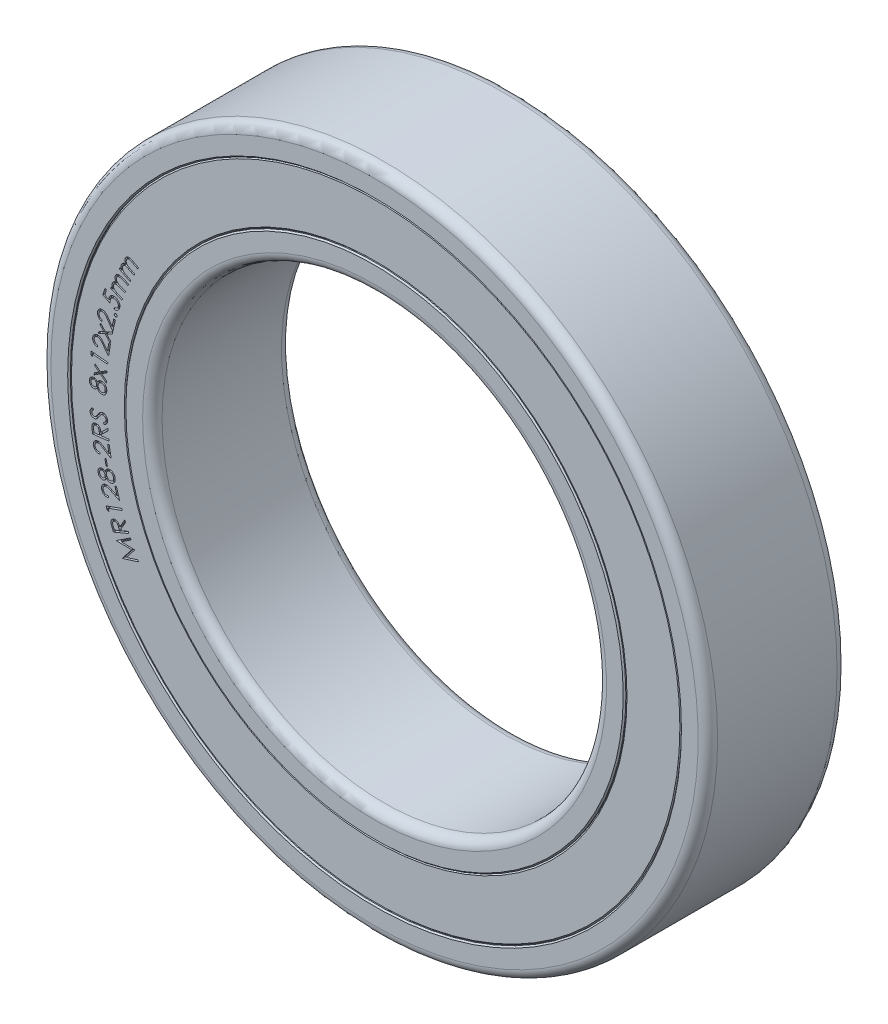
from build123d import *

# Parameters (mm, degrees)
SKETCH_R_INNER_BODY_W          = 2.5
SKETCH_R_INNER_BODY_H          = 0.5
FILLET_INNER_BODY_R            = 0.175
CHAMFER_INNER_BODY_SIZE        = 0.024
SKETCH_R_OUTER_BODY_W          = 2.5
SKETCH_R_OUTER_BODY_H          = 0.5
FILLET_OUTER_BODY_R            = 0.175
CHAMFER_OUTER_BODY_SIZE        = 0.024
SKETCH_R_SEAL_FACES_W          = 2.46
SKETCH_R_SEAL_FACES_H          = 1
CHAMFER_SEALS_SIZE             = 0.024
CUT_EXTRUDE_SEAL_LABEL_1_DEPTH = 0.05
CUT_EXTRUDE_SEAL_LABEL_2_DEPTH = 0.05


with BuildPart() as part:
    # Sketch R, INNER BODY → Revolve INNER BODY (revolve)
    with BuildSketch(Plane(origin=(0, 0, 0), x_dir=(0, 0, -1), z_dir=(1, 0, 0))):
        with Locations((0, 4.25)):
            Rectangle(SKETCH_R_INNER_BODY_W, SKETCH_R_INNER_BODY_H)
    revolve(axis=Axis((0, 0, 17.5), (0, 0, -1)))

    # Fillet INNER BODY
    fillet_inner_body_edges = [part.edges().sort_by_distance(p)[0] for p in [
        (0, -4, 1.25),
        (0, -4, -1.25),
    ]]
    fillet(fillet_inner_body_edges, radius=FILLET_INNER_BODY_R)

    # Chamfer INNER BODY
    chamfer_inner_body_edges = [part.edges().sort_by_distance(p)[0] for p in [
        (0, -4.5, -1.25),
        (0, -4.5, 1.25),
    ]]
    chamfer(chamfer_inner_body_edges, length=CHAMFER_INNER_BODY_SIZE)


with BuildPart() as body_2:
    # Sketch R, OUTER BODY → Revolve OUTER BODY (revolve)
    with BuildSketch(Plane(origin=(0, 0, 0), x_dir=(0, 0, -1), z_dir=(1, 0, 0))):
        with Locations((0, 5.75)):
            Rectangle(SKETCH_R_OUTER_BODY_W, SKETCH_R_OUTER_BODY_H)
    revolve(axis=Axis((0, 0, 17.5), (0, 0, -1)))

    # Fillet OUTER BODY
    fillet_outer_body_edges = [body_2.edges().sort_by_distance(p)[0] for p in [
        (0, -6, -1.25),
        (0, -6, 1.25),
    ]]
    fillet(fillet_outer_body_edges, radius=FILLET_OUTER_BODY_R)

    # Chamfer OUTER BODY
    chamfer_outer_body_edges = [body_2.edges().sort_by_distance(p)[0] for p in [
        (0, -5.5, 1.25),
        (0, -5.5, -1.25),
    ]]
    chamfer(chamfer_outer_body_edges, length=CHAMFER_OUTER_BODY_SIZE)


with BuildPart() as body_3:
    # Sketch R, SEAL FACES → Revolve SEALS (revolve)
    with BuildSketch(Plane(origin=(0, 0, 0), x_dir=(0, 0, -1), z_dir=(1, 0, 0))):
        with Locations((0, 5)):
            Rectangle(SKETCH_R_SEAL_FACES_W, SKETCH_R_SEAL_FACES_H)
    revolve(axis=Axis((0, 0, 17.5), (0, 0, -1)))

    # Chamfer SEALS
    chamfer_seals_edges = [body_3.edges().sort_by_distance(p)[0] for p in [
        (0, -4.5, -1.23),
        (0, -5.5, -1.23),
        (0, -5.5, 1.23),
        (0, -4.5, 1.23),
    ]]
    chamfer(chamfer_seals_edges, length=CHAMFER_SEALS_SIZE)

    # Sketch TEXT RADIUS 1 — MANUALLY ASSIGN TEXT AND FONT SIZE (FROM EQUATIONS) → Cut-Extrude SEAL LABEL 1 (cut)
    # profile 1 of 19: a face of its own
    with BuildSketch(Plane.XY.offset(1.23)):
        with BuildLine():
            Line((-4.615028938, 2.095167592), (-4.602228457, 2.120227688))
            Line((-4.602228457, 2.120227688), (-4.568334226, 2.102919996))
            add(Edge.make_bspline(
                [(-4.568334226, 2.102919996), (-4.570214189, 2.106571575), (-4.573822583, 2.113580404), (-4.577786823, 2.124205551), (-4.580741225, 2.134215112), (-4.581575729, 2.140804594), (-4.581976053, 2.143965669)],
                knots=[0, 0, 0, 0, 1.131303059, 2.171419365, 3.122802247, 4, 4, 4, 4], degree=3))
            add(Edge.make_bspline(
                [(-4.581976053, 2.143965669), (-4.582129196, 2.148055318), (-4.582430566, 2.156103395), (-4.580929417, 2.167983464), (-4.577882089, 2.179386142), (-4.574646162, 2.186492184), (-4.573021726, 2.190059419)],
                knots=[0, 0, 0, 0, 1.032059165, 2.031003556, 3.011563514, 4, 4, 4, 4], degree=3))
            add(Edge.make_bspline(
                [(-4.573021726, 2.190059419), (-4.571743275, 2.192369497), (-4.569212501, 2.196942443), (-4.564663794, 2.203311477), (-4.55946665, 2.209073351), (-4.553781763, 2.214302236), (-4.54768328, 2.218823951), (-4.541382809, 2.222677603), (-4.534832907, 2.225546041), (-4.528061428, 2.227737662), (-4.520732678, 2.229082963), (-4.512669179, 2.229467065), (-4.503763129, 2.229249598), (-4.497596633, 2.228496219), (-4.494355861, 2.228100284)],
                knots=[0, 0, 0, 0, 1.008798582, 1.996980295, 2.984033709, 3.970552215, 4.944686777, 5.882439744, 6.787540249, 7.671562716, 8.598337868, 9.626370942, 10.75255079, 12, 12, 12, 12], degree=3))
            add(Edge.make_bspline(
                [(-4.494355861, 2.228100284), (-4.496952119, 2.232104194), (-4.502005289, 2.239897118), (-4.50754467, 2.252369222), (-4.511602149, 2.264815333), (-4.513617081, 2.277362563), (-4.513914964, 2.289731998), (-4.51263409, 2.301779053), (-4.509554993, 2.313435845), (-4.506241671, 2.320709427), (-4.504572207, 2.324374323)],
                knots=[0, 0, 0, 0, 1.123717732, 2.187123881, 3.207554766, 4.203179898, 5.17188051, 6.117676607, 7.05156497, 8, 8, 8, 8], degree=3))
            add(Edge.make_bspline(
                [(-4.504572207, 2.324374323), (-4.502761652, 2.327619814), (-4.499219889, 2.333968565), (-4.49241372, 2.342329912), (-4.484757721, 2.349522215), (-4.476094662, 2.355317043), (-4.466683104, 2.359696832), (-4.456711767, 2.362720284), (-4.446197866, 2.363967295), (-4.437131709, 2.363908579), (-4.429493584, 2.362945853), (-4.423243031, 2.361640587), (-4.416515476, 2.359905888), (-4.409345955, 2.357616391), (-4.401780447, 2.354679292), (-4.393728769, 2.351304928), (-4.385174362, 2.347493525), (-4.379419431, 2.344572721), (-4.376447207, 2.343064226)],
                knots=[0, 0, 0, 0, 1.208444102, 2.363928727, 3.494988198, 4.618722664, 5.74245713, 6.865452677, 7.996794378, 9.177785441, 9.80900355, 10.50123744, 11.256070152, 12.071099808, 12.950807652, 13.898353878, 14.914571972, 16, 16, 16, 16], degree=3))
            Line((-4.376447207, 2.343064226), (-4.269355861, 2.288496919))
            Line((-4.269355861, 2.288496919), (-4.282516919, 2.262715669))
            Line((-4.282516919, 2.262715669), (-4.389608265, 2.317282976))
            add(Edge.make_bspline(
                [(-4.389608265, 2.317282976), (-4.392149776, 2.318550044), (-4.397016664, 2.320976425), (-4.404059213, 2.324387384), (-4.410582282, 2.327252826), (-4.416572615, 2.329682905), (-4.42199717, 2.331673416), (-4.426912116, 2.333195113), (-4.43125837, 2.334304741), (-4.436309274, 2.335123828), (-4.442216482, 2.335225358), (-4.449105083, 2.334434103), (-4.455802698, 2.332368333), (-4.462270162, 2.329315498), (-4.468383903, 2.325239297), (-4.47381335, 2.320025126), (-4.478712139, 2.313900761), (-4.481301677, 2.309233282), (-4.482637111, 2.306826246)],
                knots=[0, 0, 0, 0, 1.264595667, 2.421647473, 3.484052063, 4.436512053, 5.2999777, 6.05614671, 6.726825792, 7.295834762, 8.330925559, 9.346616383, 10.371043822, 11.436440054, 12.52254707, 13.626817671, 14.776141452, 16, 16, 16, 16], degree=3))
            add(Edge.make_bspline(
                [(-4.482637111, 2.306826246), (-4.484048341, 2.303760704), (-4.486850472, 2.29767378), (-4.489111464, 2.287868912), (-4.490024687, 2.277803947), (-4.489162603, 2.267598431), (-4.486998354, 2.257523613), (-4.483274802, 2.247897785), (-4.478084108, 2.238881223), (-4.472641031, 2.231795913), (-4.467322678, 2.22629481), (-4.462316661, 2.222051364), (-4.456525821, 2.217573418), (-4.449859228, 2.212934389), (-4.44235407, 2.208121797), (-4.43390135, 2.203246388), (-4.424683729, 2.198045371), (-4.41816569, 2.194685076), (-4.414788553, 2.192944034)],
                knots=[0, 0, 0, 0, 1.076215592, 2.136928694, 3.197235864, 4.295324926, 5.396825051, 6.481294896, 7.579682616, 8.711854393, 9.327684504, 10.022206524, 10.80731077, 11.667068072, 12.617340245, 13.656221702, 14.785637917, 16, 16, 16, 16], degree=3))
            Line((-4.414788553, 2.192944034), (-4.337985669, 2.153821438))
            Line((-4.337985669, 2.153821438), (-4.350786149, 2.128761342))
            Line((-4.350786149, 2.128761342), (-4.451206822, 2.179963265))
            add(Edge.make_bspline(
                [(-4.451206822, 2.179963265), (-4.454046407, 2.181395505), (-4.459502048, 2.184147243), (-4.467406526, 2.18793605), (-4.474690403, 2.191179961), (-4.481314456, 2.193965858), (-4.48729469, 2.196270204), (-4.492655877, 2.198015757), (-4.497362052, 2.199318), (-4.502741327, 2.200367308), (-4.50900591, 2.200758749), (-4.516280629, 2.20012857), (-4.523301594, 2.198199063), (-4.530051653, 2.195272141), (-4.53633708, 2.191225661), (-4.541971238, 2.186093599), (-4.546985137, 2.179979024), (-4.549576317, 2.175282563), (-4.550906342, 2.172871919)],
                knots=[0, 0, 0, 0, 1.33079301, 2.556828398, 3.667516999, 4.666955021, 5.563673428, 6.34831043, 7.025417608, 7.605742067, 8.638952847, 9.640708207, 10.647186955, 11.671930331, 12.708942439, 13.759418429, 14.849933066, 16, 16, 16, 16], degree=3))
            add(Edge.make_bspline(
                [(-4.550906342, 2.172871919), (-4.552254369, 2.169924997), (-4.554933469, 2.164068217), (-4.55707724, 2.154566294), (-4.557965316, 2.144756452), (-4.557255894, 2.13469281), (-4.555185756, 2.124712679), (-4.551659582, 2.115084295), (-4.546669154, 2.105998695), (-4.541325611, 2.098894536), (-4.536168276, 2.093415805), (-4.531517044, 2.089234259), (-4.526187776, 2.084960035), (-4.520198824, 2.080567489), (-4.513417404, 2.076202498), (-4.505968254, 2.071719415), (-4.497873939, 2.067052725), (-4.492145608, 2.064113331), (-4.489187592, 2.062595476)],
                knots=[0, 0, 0, 0, 1.087819318, 2.161957474, 3.257994717, 4.392829965, 5.54295624, 6.677451127, 7.829748086, 9.018779822, 9.657745886, 10.359183035, 11.12134093, 11.955889271, 12.857031442, 13.833851511, 14.881436139, 16, 16, 16, 16], degree=3))
            Line((-4.489187592, 2.062595476), (-4.406074611, 2.020227688))
            Line((-4.406074611, 2.020227688), (-4.418875092, 1.995167592))
            Line((-4.418875092, 1.995167592), (-4.615028938, 2.095167592))
        make_face()
    # profile 2 of 19: a face of its own
    with BuildSketch(Plane.XY.offset(1.23)):
        with BuildLine():
            Line((-4.771647887, 1.713600259), (-4.76161183, 1.739982471))
            Line((-4.76161183, 1.739982471), (-4.72597481, 1.72640074))
            add(Edge.make_bspline(
                [(-4.72597481, 1.72640074), (-4.728223314, 1.729848265), (-4.73252891, 1.736449834), (-4.737701579, 1.746563516), (-4.741694806, 1.756208958), (-4.743257371, 1.762675351), (-4.744003657, 1.765763721)],
                knots=[0, 0, 0, 0, 1.133095226, 2.169732026, 3.125858193, 4, 4, 4, 4], degree=3))
            add(Edge.make_bspline(
                [(-4.744003657, 1.765763721), (-4.744600959, 1.769821501), (-4.74577689, 1.777810192), (-4.745510877, 1.789826818), (-4.743807656, 1.801552393), (-4.741294471, 1.808982223), (-4.74003731, 1.812698817)],
                knots=[0, 0, 0, 0, 1.030768073, 2.029308816, 3.014209263, 4, 4, 4, 4], degree=3))
            add(Edge.make_bspline(
                [(-4.74003731, 1.812698817), (-4.7390297, 1.815148786), (-4.737031513, 1.820007308), (-4.73309421, 1.826803704), (-4.728690618, 1.833242814), (-4.723493397, 1.839020739), (-4.7179259, 1.844198086), (-4.712042459, 1.848661056), (-4.705883354, 1.852271063), (-4.699379477, 1.855202618), (-4.692214081, 1.857248035), (-4.684235545, 1.858586782), (-4.675326881, 1.859317617), (-4.669084952, 1.859209645), (-4.66581856, 1.859153144)],
                knots=[0, 0, 0, 0, 1.009026584, 2.000995504, 2.988454581, 3.978657383, 4.957004591, 5.884312937, 6.788234911, 7.67393216, 8.597268066, 9.620734039, 10.754933646, 12, 12, 12, 12], degree=3))
            add(Edge.make_bspline(
                [(-4.66581856, 1.859153144), (-4.668813871, 1.862893586), (-4.674641911, 1.870171445), (-4.681677071, 1.881935163), (-4.68689864, 1.893979933), (-4.690378348, 1.906227051), (-4.691981381, 1.918517201), (-4.691951802, 1.930649492), (-4.690179662, 1.942598027), (-4.687647699, 1.950208738), (-4.686371445, 1.954044971)],
                knots=[0, 0, 0, 0, 1.125888937, 2.190666514, 3.211882286, 4.205129615, 5.174486086, 6.11663135, 7.050674863, 8, 8, 8, 8], degree=3))
            add(Edge.make_bspline(
                [(-4.686371445, 1.954044971), (-4.684928041, 1.957480035), (-4.68211123, 1.964183582), (-4.676270583, 1.973260167), (-4.669378216, 1.981205461), (-4.661413144, 1.987988067), (-4.652507409, 1.9933765), (-4.642874098, 1.997416235), (-4.632575744, 1.999944838), (-4.623509768, 2.00075272), (-4.615803836, 2.000711197), (-4.609448035, 2.000037648), (-4.60255601, 1.999047251), (-4.595193462, 1.997428409), (-4.587291012, 1.995447105), (-4.578881036, 1.992991179), (-4.569989376, 1.989943153), (-4.563911198, 1.987710596), (-4.560770483, 1.98655699)],
                knots=[0, 0, 0, 0, 1.208773262, 2.358928403, 3.489224728, 4.615973589, 5.743399018, 6.857899423, 7.997657427, 9.174447686, 9.805830941, 10.498822853, 11.249026251, 12.06729412, 12.946579155, 13.896077612, 14.912861734, 16, 16, 16, 16], degree=3))
            Line((-4.560770483, 1.98655699), (-4.448090195, 1.943768529))
            Line((-4.448090195, 1.943768529), (-4.458366637, 1.916665163))
            Line((-4.458366637, 1.916665163), (-4.571046926, 1.959453625))
            add(Edge.make_bspline(
                [(-4.571046926, 1.959453625), (-4.573708396, 1.960442741), (-4.578816535, 1.962341144), (-4.586213892, 1.964953774), (-4.593031579, 1.967108693), (-4.599266457, 1.968863765), (-4.604889456, 1.970276605), (-4.60994938, 1.97122806), (-4.614398389, 1.971882951), (-4.619509386, 1.972117072), (-4.625424095, 1.971670436), (-4.632183087, 1.969999021), (-4.638702789, 1.967350289), (-4.644802948, 1.963534749), (-4.650419285, 1.958782169), (-4.655348777, 1.953059784), (-4.659460034, 1.946355525), (-4.661554551, 1.941435242), (-4.662633464, 1.93890074)],
                knots=[0, 0, 0, 0, 1.260885945, 2.420007814, 3.48349519, 4.435389166, 5.296263433, 6.056946811, 6.721220755, 7.29117818, 8.326194147, 9.342421993, 10.371610726, 11.438107504, 12.523615893, 13.627450206, 14.777868859, 16, 16, 16, 16], degree=3))
            add(Edge.make_bspline(
                [(-4.662633464, 1.93890074), (-4.663710213, 1.935683351), (-4.665840627, 1.929317553), (-4.667006439, 1.919281119), (-4.666816035, 1.909170847), (-4.664906978, 1.899082662), (-4.661563518, 1.889326556), (-4.656810033, 1.880143106), (-4.65075309, 1.871657642), (-4.644531265, 1.86520114), (-4.638553824, 1.860398469), (-4.633209406, 1.85658946), (-4.626905563, 1.852861154), (-4.619813389, 1.848928673), (-4.611802602, 1.844979992), (-4.602884037, 1.84097906), (-4.593128017, 1.836814802), (-4.586260635, 1.834189879), (-4.58270558, 1.832831029)],
                knots=[0, 0, 0, 0, 1.079938294, 2.13672301, 3.204430061, 4.296350377, 5.397955319, 6.484249075, 7.58390534, 8.713939808, 9.331848047, 10.028798692, 10.805978953, 11.667046949, 12.61604681, 13.654424805, 14.785759992, 16, 16, 16, 16], degree=3))
            Line((-4.58270558, 1.832831029), (-4.501876253, 1.802121894))
            Line((-4.501876253, 1.802121894), (-4.51191231, 1.775739682))
            Line((-4.51191231, 1.775739682), (-4.617561349, 1.815883913))
            add(Edge.make_bspline(
                [(-4.617561349, 1.815883913), (-4.620564749, 1.816989408), (-4.626321066, 1.8191082), (-4.634590509, 1.822084921), (-4.642190888, 1.824554804), (-4.649102665, 1.826602864), (-4.655324556, 1.828265225), (-4.660873166, 1.829374795), (-4.665692401, 1.83023771), (-4.671163721, 1.830623301), (-4.677444542, 1.830311541), (-4.684615989, 1.828885833), (-4.691442179, 1.826259113), (-4.697789179, 1.822492285), (-4.703675196, 1.817844092), (-4.708678322, 1.812078456), (-4.712981132, 1.805457392), (-4.715052786, 1.800517673), (-4.716119041, 1.797975259)],
                knots=[0, 0, 0, 0, 1.335986728, 2.560553, 3.668564895, 4.671363709, 5.569859893, 6.355414944, 7.033163965, 7.611666965, 8.641437535, 9.648376784, 10.651593895, 11.678474471, 12.719321792, 13.767933242, 14.851181968, 16, 16, 16, 16], degree=3))
            add(Edge.make_bspline(
                [(-4.716119041, 1.797975259), (-4.717145257, 1.794896363), (-4.719189431, 1.788763344), (-4.720388006, 1.779077931), (-4.720135911, 1.769197597), (-4.718391562, 1.75925614), (-4.71521673, 1.749511196), (-4.710617417, 1.740316937), (-4.704640289, 1.731796697), (-4.698532787, 1.725325435), (-4.692844748, 1.720383837), (-4.687731833, 1.716770779), (-4.682036092, 1.712982627), (-4.675502993, 1.709401688), (-4.668360345, 1.705609392), (-4.66041699, 1.702013981), (-4.651813393, 1.698316046), (-4.645794669, 1.695992168), (-4.642681541, 1.694790163)],
                knots=[0, 0, 0, 0, 1.087072933, 2.165398619, 3.254943049, 4.394577046, 5.540599365, 6.683204518, 7.832201144, 9.021373595, 9.660215445, 10.358201145, 11.120929662, 11.9548918, 12.857073776, 13.834764351, 14.880052216, 16, 16, 16, 16], degree=3))
            Line((-4.642681541, 1.694790163), (-4.555241637, 1.66155699))
            Line((-4.555241637, 1.66155699), (-4.565277695, 1.635174779))
            Line((-4.565277695, 1.635174779), (-4.771647887, 1.713600259))
        make_face()
    # profile 3 of 19: a face of its own
    with BuildSketch(Plane.XY.offset(1.23)):
        with BuildLine():
            Line((-4.872619778, 1.668341385), (-4.845516413, 1.660048116))
            Line((-4.845516413, 1.660048116), (-4.876465932, 1.558726))
            Line((-4.876465932, 1.558726), (-4.803208721, 1.520925519))
            add(Edge.make_bspline(
                [(-4.803208721, 1.520925519), (-4.803105094, 1.524192768), (-4.802905086, 1.530498827), (-4.802019125, 1.539639691), (-4.800555113, 1.548102668), (-4.799101444, 1.553446755), (-4.798401028, 1.556021673)],
                knots=[0, 0, 0, 0, 1.103771075, 2.130369393, 3.09916414, 4, 4, 4, 4], degree=3))
            add(Edge.make_bspline(
                [(-4.798401028, 1.556021673), (-4.797356086, 1.559168138), (-4.79530472, 1.565345081), (-4.791303263, 1.574104698), (-4.786624778, 1.582186617), (-4.78121185, 1.589568052), (-4.775212036, 1.596352597), (-4.768437475, 1.602379101), (-4.760959527, 1.607694449), (-4.752924542, 1.612353734), (-4.744401724, 1.616182657), (-4.735595202, 1.619168097), (-4.726540565, 1.621134723), (-4.717302779, 1.622220369), (-4.70786042, 1.622409776), (-4.698202913, 1.621597059), (-4.688324651, 1.619863183), (-4.681780531, 1.618018461), (-4.678449105, 1.617079366)],
                knots=[0, 0, 0, 0, 1.053814754, 2.06878347, 3.056575513, 4.018660261, 4.975223705, 5.931787148, 6.895305202, 7.888608411, 8.880910007, 9.862043652, 10.840526138, 11.821990674, 12.816029119, 13.838726336, 14.899757244, 16, 16, 16, 16], degree=3))
            add(Edge.make_bspline(
                [(-4.678449105, 1.617079366), (-4.676137507, 1.616321267), (-4.671570646, 1.614823545), (-4.664919442, 1.612194099), (-4.658617378, 1.609080419), (-4.652498387, 1.605737421), (-4.646686736, 1.601942933), (-4.641140115, 1.59779408), (-4.635898315, 1.593256444), (-4.630939291, 1.588421794), (-4.626303655, 1.583303348), (-4.622053919, 1.577994596), (-4.618244648, 1.572489007), (-4.614855112, 1.566815575), (-4.611915932, 1.560951895), (-4.60944996, 1.554870418), (-4.607329508, 1.548662534), (-4.605720796, 1.542245898), (-4.604503766, 1.535725171), (-4.603804775, 1.52907427), (-4.603479595, 1.522350013), (-4.603691576, 1.515525292), (-4.604276462, 1.508597951), (-4.605366382, 1.501572163), (-4.606939917, 1.494453802), (-4.608291948, 1.489729051), (-4.608977952, 1.487331769)],
                knots=[0, 0, 0, 0, 1.06180878, 2.097739893, 3.118428788, 4.128235545, 5.139593263, 6.14515106, 7.149529628, 8.163605243, 9.166460178, 10.161969212, 11.129750546, 12.086487506, 13.044542148, 13.989580011, 14.949070061, 15.905527278, 16.874532379, 17.842076676, 18.822377935, 19.81079592, 20.820148288, 21.855230292, 22.911769517, 24, 24, 24, 24], degree=3))
            add(Edge.make_bspline(
                [(-4.608977952, 1.487331769), (-4.609909364, 1.484508249), (-4.611734666, 1.478974958), (-4.615288585, 1.471116441), (-4.61927673, 1.463768659), (-4.623897753, 1.456975034), (-4.629068663, 1.450697877), (-4.634843614, 1.444998838), (-4.641168383, 1.439838642), (-4.647963978, 1.435246727), (-4.655152677, 1.43129981), (-4.662586361, 1.428020819), (-4.670235825, 1.425491233), (-4.678106292, 1.423700475), (-4.686164233, 1.422514331), (-4.694452834, 1.422220813), (-4.70294412, 1.422447159), (-4.708622701, 1.423271809), (-4.71150199, 1.423689942)],
                knots=[0, 0, 0, 0, 1.076659557, 2.109943731, 3.120256004, 4.10272742, 5.082298625, 6.062649432, 7.037610991, 8.036173217, 9.030266871, 10.005336507, 10.976290764, 11.944718436, 12.927109406, 13.922500747, 14.946616836, 16, 16, 16, 16], degree=3))
            Line((-4.71150199, 1.423689942), (-4.702607759, 1.452896673))
            add(Edge.make_bspline(
                [(-4.702607759, 1.452896673), (-4.699805079, 1.452674697), (-4.694381416, 1.452245135), (-4.686500109, 1.4526271), (-4.679214839, 1.453739331), (-4.672476915, 1.455677339), (-4.666201612, 1.458493692), (-4.660313319, 1.462126647), (-4.654711999, 1.466522177), (-4.649481813, 1.471632142), (-4.644789859, 1.47738277), (-4.640631021, 1.483501496), (-4.637366905, 1.490139912), (-4.635753168, 1.494785199), (-4.63493949, 1.497127442)],
                knots=[0, 0, 0, 0, 1.146847477, 2.219344454, 3.212981148, 4.149901864, 5.072470373, 6.012242346, 6.967684147, 7.973996186, 8.990788686, 9.993371658, 10.988219284, 12, 12, 12, 12], degree=3))
            add(Edge.make_bspline(
                [(-4.63493949, 1.497127442), (-4.63428357, 1.499438981), (-4.632985839, 1.504012332), (-4.632016746, 1.511018876), (-4.631672785, 1.517965007), (-4.63218046, 1.524856632), (-4.633393402, 1.531701848), (-4.635331106, 1.538504271), (-4.637980378, 1.54528123), (-4.641426985, 1.551884284), (-4.645362598, 1.558277689), (-4.649992071, 1.564151917), (-4.655122957, 1.569501397), (-4.66070587, 1.574416695), (-4.666894666, 1.578695373), (-4.673614377, 1.582414064), (-4.680818135, 1.585693108), (-4.68590355, 1.587377917), (-4.688485163, 1.588233212)],
                knots=[0, 0, 0, 0, 0.978934231, 1.936809946, 2.877279475, 3.810981668, 4.748572149, 5.708118942, 6.691271857, 7.710757459, 8.742220572, 9.749022847, 10.754531395, 11.762162109, 12.777547117, 13.816329665, 14.891458671, 16, 16, 16, 16], degree=3))
            add(Edge.make_bspline(
                [(-4.688485163, 1.588233212), (-4.690859098, 1.588896246), (-4.695486401, 1.59018864), (-4.702487629, 1.59138981), (-4.709309178, 1.59197007), (-4.715990006, 1.591745405), (-4.722486719, 1.591020239), (-4.72883299, 1.589473758), (-4.734979404, 1.587241928), (-4.740967746, 1.584435216), (-4.74657138, 1.580933171), (-4.751863213, 1.57695687), (-4.756682675, 1.572395588), (-4.760951288, 1.567194829), (-4.764912658, 1.561550563), (-4.768277298, 1.555261625), (-4.771360809, 1.548503044), (-4.772908215, 1.543700234), (-4.773701509, 1.541238019)],
                knots=[0, 0, 0, 0, 1.078589119, 2.102399841, 3.105410342, 4.070584215, 5.0246951, 5.962869138, 6.922807996, 7.884028268, 8.852822029, 9.810634775, 10.778475154, 11.749885888, 12.752282599, 13.792493225, 14.868297041, 16, 16, 16, 16], degree=3))
            add(Edge.make_bspline(
                [(-4.773701509, 1.541238019), (-4.774320393, 1.539083462), (-4.775598145, 1.534635148), (-4.776820109, 1.527599783), (-4.777903108, 1.520111764), (-4.778444461, 1.512139879), (-4.778716433, 1.503698658), (-4.778468219, 1.494779295), (-4.778047695, 1.485372797), (-4.777398854, 1.478956052), (-4.777066894, 1.475673116)],
                knots=[0, 0, 0, 0, 0.813731525, 1.680035259, 2.590796401, 3.561340025, 4.580505069, 5.657689859, 6.80162665, 8, 8, 8, 8], degree=3))
            Line((-4.777066894, 1.475673116), (-4.910239971, 1.545144269))
            Line((-4.910239971, 1.545144269), (-4.872619778, 1.668341385))
        make_face()
    # profile 4 of 19: a face of its own
    with BuildSketch(Plane.XY.offset(1.23)):
        with BuildLine():
            add(Edge.make_bspline(
                [(-4.704835584, 1.348919667), (-4.704294812, 1.350488801), (-4.703227552, 1.353585622), (-4.700604836, 1.357711298), (-4.697169473, 1.361189428), (-4.693053882, 1.363952206), (-4.688488908, 1.366017834), (-4.683638054, 1.367037418), (-4.678656191, 1.367153916), (-4.675418937, 1.366381434), (-4.673765872, 1.365986975)],
                knots=[0, 0, 0, 0, 1.008413375, 1.990190354, 2.948014201, 3.966784863, 4.993925634, 5.980015809, 6.968519178, 8, 8, 8, 8], degree=3))
            add(Edge.make_bspline(
                [(-4.673765872, 1.365986975), (-4.672175798, 1.365448926), (-4.669054925, 1.364392885), (-4.664887609, 1.361741121), (-4.661399895, 1.358265456), (-4.658553197, 1.354179453), (-4.656511455, 1.349631938), (-4.655382996, 1.344858917), (-4.655311638, 1.339932323), (-4.656031012, 1.336731053), (-4.656398084, 1.335097552)],
                knots=[0, 0, 0, 0, 1.021235543, 2.004400996, 2.980860545, 4.008001129, 5.025427718, 6.003644384, 6.981326609, 8, 8, 8, 8], degree=3))
            add(Edge.make_bspline(
                [(-4.656398084, 1.335097552), (-4.656933213, 1.333505882), (-4.657978122, 1.330397939), (-4.660664193, 1.32625319), (-4.664162032, 1.322808765), (-4.668281933, 1.319986005), (-4.672863571, 1.318027959), (-4.677672645, 1.316966137), (-4.68261276, 1.316877159), (-4.685834069, 1.317602356), (-4.687467795, 1.317970148)],
                knots=[0, 0, 0, 0, 1.020316889, 1.992300802, 2.9764769, 3.995770621, 5.018568084, 5.99323207, 6.982242959, 8, 8, 8, 8], degree=3))
            add(Edge.make_bspline(
                [(-4.687467795, 1.317970148), (-4.68908215, 1.318501858), (-4.692259866, 1.319548483), (-4.696416919, 1.322289834), (-4.700041201, 1.325649204), (-4.702792006, 1.329791343), (-4.704803908, 1.334344761), (-4.705827368, 1.339147884), (-4.705928058, 1.344083609), (-4.705204693, 1.347285732), (-4.704835584, 1.348919667)],
                knots=[0, 0, 0, 0, 1.029305491, 2.02609836, 2.999699821, 4.016606646, 5.025824775, 6.010110901, 6.984626257, 8, 8, 8, 8], degree=3))
        make_face()
    # profile 5 of 19: a face of its own
    with BuildSketch(Plane.XY.offset(1.23)):
        with BuildLine():
            Line((-4.922719195, 1.145603644), (-4.929209579, 1.117779125))
            add(Edge.make_bspline(
                [(-4.929209579, 1.117779125), (-4.932675651, 1.118779201), (-4.939485419, 1.120744044), (-4.949165661, 1.124689434), (-4.958202346, 1.129276872), (-4.966582609, 1.134551101), (-4.974261205, 1.140609537), (-4.981272043, 1.147370606), (-4.987585587, 1.154860071), (-4.993223249, 1.162933323), (-4.998012661, 1.171490477), (-5.001873997, 1.180349512), (-5.004789137, 1.189408365), (-5.006693848, 1.198657552), (-5.007771236, 1.208095778), (-5.007694706, 1.217737606), (-5.006864902, 1.227613367), (-5.005464147, 1.234156733), (-5.004750445, 1.237490663)],
                knots=[0, 0, 0, 0, 1.097484803, 2.156221038, 3.1761584, 4.179333966, 5.165010288, 6.148250436, 7.139043866, 8.142145298, 9.141309779, 10.118956018, 11.079315416, 12.032465581, 12.989353451, 13.965000898, 14.963141463, 16, 16, 16, 16], degree=3))
            add(Edge.make_bspline(
                [(-5.004750445, 1.237490663), (-5.003905639, 1.240733024), (-5.002251695, 1.247080851), (-4.9988566, 1.256138671), (-4.99479351, 1.264538584), (-4.989918836, 1.272212834), (-4.984473521, 1.279283713), (-4.978257275, 1.285641301), (-4.971405934, 1.291393378), (-4.963831811, 1.296317143), (-4.955919234, 1.300536072), (-4.947836703, 1.304026985), (-4.939601479, 1.306530491), (-4.93128106, 1.308310261), (-4.922822828, 1.309203188), (-4.91426609, 1.309277537), (-4.905611523, 1.308420429), (-4.89989413, 1.307252791), (-4.896998041, 1.306661336)],
                knots=[0, 0, 0, 0, 1.123966634, 2.200478257, 3.240879859, 4.250050364, 5.246622225, 6.230847569, 7.228575453, 8.243017914, 9.256680249, 10.235747965, 11.192750993, 12.140855889, 13.087529323, 14.042286001, 15.008339183, 16, 16, 16, 16], degree=3))
            add(Edge.make_bspline(
                [(-4.896998041, 1.306661336), (-4.892980087, 1.305555767), (-4.885014929, 1.303364097), (-4.873657866, 1.298386767), (-4.863155476, 1.291841092), (-4.854886968, 1.285335438), (-4.848463921, 1.279173518), (-4.843280801, 1.273748354), (-4.837825265, 1.267461295), (-4.832013849, 1.260387422), (-4.825894162, 1.252503134), (-4.819448299, 1.243837407), (-4.81274171, 1.23432836), (-4.808188632, 1.227700021), (-4.805832175, 1.224269509)],
                knots=[0, 0, 0, 0, 1.18871342, 2.356495586, 3.524725812, 4.713563047, 5.352725839, 6.064660389, 6.854998345, 7.728604241, 8.678135495, 9.704158321, 10.811781969, 12, 12, 12, 12], degree=3))
            Line((-4.805832175, 1.224269509), (-4.744894675, 1.133824798))
            Line((-4.744894675, 1.133824798), (-4.713464387, 1.267719028))
            Line((-4.713464387, 1.267719028), (-4.685459579, 1.261168548))
            Line((-4.685459579, 1.261168548), (-4.731673522, 1.064173355))
            Line((-4.731673522, 1.064173355), (-4.825423522, 1.203055567))
            add(Edge.make_bspline(
                [(-4.825423522, 1.203055567), (-4.827705054, 1.206422358), (-4.832087502, 1.212889411), (-4.838427996, 1.222173617), (-4.844447739, 1.230543253), (-4.85008628, 1.238014571), (-4.855231767, 1.244678693), (-4.860054142, 1.250385361), (-4.864431182, 1.255267252), (-4.869627488, 1.260617455), (-4.876267918, 1.266088331), (-4.884633922, 1.27148352), (-4.893582068, 1.275692354), (-4.899891621, 1.277424178), (-4.903067752, 1.278295951)],
                knots=[0, 0, 0, 0, 1.320694487, 2.536836767, 3.650715111, 4.66810045, 5.576383332, 6.384289563, 7.093604816, 7.705387654, 8.804793099, 9.878455799, 10.932047524, 12, 12, 12, 12], degree=3))
            add(Edge.make_bspline(
                [(-4.903067752, 1.278295951), (-4.905083741, 1.278723023), (-4.909048064, 1.279562835), (-4.915080079, 1.280011033), (-4.921016316, 1.279898499), (-4.926888457, 1.279197602), (-4.932655003, 1.277763544), (-4.938357187, 1.275793233), (-4.943997251, 1.273181214), (-4.94945296, 1.269955523), (-4.954650767, 1.266266918), (-4.959415783, 1.262160754), (-4.963734248, 1.257713851), (-4.967463165, 1.252775286), (-4.970771156, 1.247520372), (-4.973553857, 1.241857287), (-4.975866066, 1.235824769), (-4.976966303, 1.231593608), (-4.977526887, 1.229437778)],
                knots=[0, 0, 0, 0, 0.998049511, 1.96260574, 2.924224226, 3.873404915, 4.822635282, 5.799288711, 6.794309808, 7.830286861, 8.867764903, 9.880029085, 10.875950204, 11.866554135, 12.874336358, 13.8819314, 14.920817485, 16, 16, 16, 16], degree=3))
            add(Edge.make_bspline(
                [(-4.977526887, 1.229437778), (-4.97801209, 1.227161685), (-4.978967599, 1.222679378), (-4.979616031, 1.215910343), (-4.979605288, 1.209313353), (-4.979045527, 1.202858089), (-4.977674309, 1.196588228), (-4.975754452, 1.190450337), (-4.973236801, 1.184439323), (-4.96995199, 1.178695015), (-4.966146507, 1.173156259), (-4.961661312, 1.168047808), (-4.956625643, 1.163297982), (-4.950954031, 1.15900085), (-4.944740886, 1.155029686), (-4.937969912, 1.151390437), (-4.930582122, 1.148216982), (-4.925377268, 1.146487086), (-4.922719195, 1.145603644)],
                knots=[0, 0, 0, 0, 1.000790848, 1.970856162, 2.91903676, 3.836795011, 4.75309483, 5.674569698, 6.601551477, 7.550985039, 8.517020789, 9.48846382, 10.470253784, 11.490893316, 12.545369413, 13.640595939, 14.795073215, 16, 16, 16, 16], degree=3))
        make_face()
    # profile 6 of 19: a face of its own
    with BuildSketch(Plane.XY.offset(1.23)):
        Polygon((-4.989200881, 0.905562598), (-4.982530208, 0.939036156), (-4.890823477, 0.980322214), (-4.959573477, 1.053699617), (-4.952902804, 1.087113079), (-4.864741746, 0.992521733), (-4.734453285, 1.053218848), (-4.74124415, 1.019384714), (-4.845450881, 0.971247694), (-4.76750617, 0.887774137), (-4.774176843, 0.854540964), (-4.87141242, 0.95928856), align=None)
    # profile 7 of 19: a face of its own
    with BuildSketch(Plane.XY.offset(1.23)):
        with BuildLine():
            Line((-5.004434234, 0.70841751), (-5.009001542, 0.680112222))
            add(Edge.make_bspline(
                [(-5.009001542, 0.680112222), (-5.01254158, 0.680876136), (-5.019495169, 0.682376668), (-5.029503173, 0.68556909), (-5.038863698, 0.689561824), (-5.047635727, 0.694254528), (-5.055788, 0.699730599), (-5.063263077, 0.706034284), (-5.070159458, 0.713043031), (-5.076379157, 0.720740681), (-5.081733973, 0.729008808), (-5.086304113, 0.737569967), (-5.089860116, 0.746438984), (-5.09244275, 0.755568612), (-5.094156794, 0.764944723), (-5.094855697, 0.774611031), (-5.0946305, 0.784555498), (-5.093758813, 0.791215532), (-5.093316446, 0.794595395)],
                knots=[0, 0, 0, 0, 1.097352159, 2.155495546, 3.178486342, 4.178289786, 5.166911116, 6.14965921, 7.13727298, 8.143473231, 9.143921882, 10.119080202, 11.080932108, 12.034312776, 12.990763299, 13.965070456, 14.967305081, 16, 16, 16, 16], degree=3))
            add(Edge.make_bspline(
                [(-5.093316446, 0.794595395), (-5.092721689, 0.797915911), (-5.09155884, 0.804408067), (-5.08872816, 0.813706665), (-5.08526672, 0.822423818), (-5.080987331, 0.830499886), (-5.075960596, 0.837944638), (-5.070220802, 0.844795084), (-5.063689431, 0.850996921), (-5.056502557, 0.856543013), (-5.048884312, 0.861389426), (-5.040964407, 0.865346211), (-5.032940205, 0.868578536), (-5.024730737, 0.870955033), (-5.016320262, 0.872367119), (-5.007753594, 0.873040389), (-4.999011098, 0.872887742), (-4.993190918, 0.872097738), (-4.990251542, 0.87169876)],
                knots=[0, 0, 0, 0, 1.125412954, 2.200368024, 3.238660764, 4.252915136, 5.245345926, 6.232715567, 7.230876699, 8.246277122, 9.259384147, 10.240459028, 11.19802133, 12.144282003, 13.08770204, 14.040276212, 15.010277322, 16, 16, 16, 16], degree=3))
            add(Edge.make_bspline(
                [(-4.990251542, 0.87169876), (-4.986137734, 0.870904366), (-4.977987723, 0.869330562), (-4.966283924, 0.865093507), (-4.955260285, 0.859381475), (-4.946545443, 0.853392609), (-4.939679245, 0.847668146), (-4.934106846, 0.84257203), (-4.928211407, 0.836662855), (-4.921798004, 0.830085971), (-4.915168353, 0.822574785), (-4.908069354, 0.814363927), (-4.90062147, 0.80534255), (-4.895608646, 0.799011632), (-4.893015965, 0.795737222)],
                knots=[0, 0, 0, 0, 1.189652955, 2.356863713, 3.52337966, 4.711218443, 5.354319348, 6.063764458, 6.857050411, 7.726984099, 8.674724307, 9.704399686, 10.812693718, 12, 12, 12, 12], degree=3))
            Line((-4.893015965, 0.795737222), (-4.825407792, 0.709499241))
            Line((-4.825407792, 0.709499241), (-4.803592888, 0.84591751))
            Line((-4.803592888, 0.84591751), (-4.775047215, 0.841350203))
            Line((-4.775047215, 0.841350203), (-4.807138561, 0.640629049))
            Line((-4.807138561, 0.640629049), (-4.911104907, 0.773080972))
            add(Edge.make_bspline(
                [(-4.911104907, 0.773080972), (-4.913625774, 0.776288486), (-4.918479924, 0.782464835), (-4.925519676, 0.791319271), (-4.932221059, 0.799214671), (-4.938326451, 0.806364831), (-4.944042727, 0.812575151), (-4.949195722, 0.81804207), (-4.953938039, 0.822603606), (-4.959550663, 0.827563671), (-4.966571718, 0.832569643), (-4.975329843, 0.837404734), (-4.984615208, 0.840885166), (-4.991050839, 0.842195527), (-4.994277984, 0.842852607)],
                knots=[0, 0, 0, 0, 1.319388685, 2.540598427, 3.657928039, 4.668407582, 5.580956387, 6.387418791, 7.097605194, 7.708270206, 8.808566358, 9.878323112, 10.936085461, 12, 12, 12, 12], degree=3))
            add(Edge.make_bspline(
                [(-4.994277984, 0.842852607), (-4.996338147, 0.843108826), (-5.000387557, 0.843612445), (-5.006468179, 0.843743269), (-5.012420438, 0.843221282), (-5.018238051, 0.841953656), (-5.02396981, 0.840266599), (-5.029534302, 0.837785711), (-5.035005663, 0.834805071), (-5.040255762, 0.831192742), (-5.045211798, 0.827163689), (-5.049687812, 0.822697349), (-5.053612026, 0.817848214), (-5.057045784, 0.812683309), (-5.059962433, 0.807144841), (-5.062347459, 0.801266417), (-5.064252345, 0.79503423), (-5.065034338, 0.790719093), (-5.06543183, 0.788525683)],
                knots=[0, 0, 0, 0, 1.000369499, 1.96630343, 2.926329453, 3.873346525, 4.832595041, 5.801421285, 6.804165359, 7.832758655, 8.868985485, 9.879650653, 10.875113487, 11.871512787, 12.865100041, 13.88732653, 14.926115334, 16, 16, 16, 16], degree=3))
            add(Edge.make_bspline(
                [(-5.06543183, 0.788525683), (-5.065734978, 0.786205561), (-5.0663317, 0.781638587), (-5.066479694, 0.774818926), (-5.066117487, 0.768187754), (-5.064937718, 0.761790273), (-5.063171697, 0.755598589), (-5.060848924, 0.74957664), (-5.057816992, 0.743777693), (-5.054137341, 0.738251068), (-5.049882174, 0.733025938), (-5.045043462, 0.72820204), (-5.039661815, 0.723774819), (-5.033691176, 0.719849673), (-5.027219245, 0.716223554), (-5.020101699, 0.713255252), (-5.012513084, 0.710460093), (-5.007173496, 0.70911008), (-5.004434234, 0.70841751)],
                knots=[0, 0, 0, 0, 1.001575277, 1.971519547, 2.917289705, 3.841324167, 4.751227111, 5.672228804, 6.600992052, 7.548162429, 8.511709385, 9.482488277, 10.470184242, 11.491125973, 12.539569986, 13.642596811, 14.790628792, 16, 16, 16, 16], degree=3))
        make_face()
    # profile 8 of 19: a face of its own
    with BuildSketch(Plane.XY.offset(1.23)):
        Polygon((-5.124766697, 0.503736421), (-5.119358043, 0.562390267), (-4.820980639, 0.534746037), (-4.823745062, 0.505118633), (-5.092915735, 0.530058537), (-5.097242658, 0.483183537), align=None)
    # profile 9 of 19: a face of its own
    with BuildSketch(Plane.XY.offset(1.23)):
        Polygon((-5.066144451, 0.219587238), (-5.064101182, 0.253661757), (-4.978764643, 0.307027142), (-5.056949739, 0.37048868), (-5.054846374, 0.4045632), (-4.954605989, 0.322712238), (-4.833572336, 0.400596854), (-4.835675701, 0.366101661), (-4.932490605, 0.304202623), (-4.843908874, 0.232027142), (-4.845952143, 0.198132911), (-4.956649259, 0.288818007), align=None)
    # profile 10 of 19: a face of its own
    with BuildSketch(Plane.XY.offset(1.23)):
        with BuildLine():
            add(Edge.make_bspline(
                [(-5.009458389, 0.133224141), (-5.008138354, 0.135640696), (-5.005576235, 0.140331103), (-5.00145413, 0.146996138), (-4.9972302, 0.153118717), (-4.99279548, 0.158647804), (-4.988375252, 0.163752878), (-4.983757299, 0.168237872), (-4.979020883, 0.172203174), (-4.974148443, 0.175628325), (-4.969122005, 0.178597197), (-4.963953774, 0.181121767), (-4.958621863, 0.18322307), (-4.953176756, 0.18500002), (-4.947532493, 0.186224458), (-4.941779882, 0.187165881), (-4.935846341, 0.18756073), (-4.931854503, 0.187554315), (-4.929830985, 0.187551064)],
                knots=[0, 0, 0, 0, 1.291580532, 2.506890574, 3.67480484, 4.778492979, 5.83052074, 6.840664507, 7.794833451, 8.725623026, 9.631407483, 10.530832046, 11.420830023, 12.318387028, 13.214368335, 14.127484446, 15.050795766, 16, 16, 16, 16], degree=3))
            add(Edge.make_bspline(
                [(-4.929830985, 0.187551064), (-4.927001866, 0.187399287), (-4.921398748, 0.187098689), (-4.913157595, 0.185803891), (-4.905180877, 0.183904878), (-4.897499166, 0.181230426), (-4.890073899, 0.177852853), (-4.882929974, 0.173745624), (-4.876030894, 0.16900597), (-4.871766874, 0.165355269), (-4.869614639, 0.163512602)],
                knots=[0, 0, 0, 0, 1.025753165, 2.031521453, 3.017140076, 3.992473795, 4.973191676, 5.967771983, 6.974246835, 8, 8, 8, 8], degree=3))
            add(Edge.make_bspline(
                [(-4.869614639, 0.163512602), (-4.867080929, 0.161092422), (-4.862054708, 0.156291415), (-4.855757383, 0.14796883), (-4.850332288, 0.13906173), (-4.846093083, 0.129335512), (-4.842741589, 0.11895887), (-4.840577497, 0.107843238), (-4.839333056, 0.096033871), (-4.839368187, 0.087934799), (-4.839386273, 0.083765006)],
                knots=[0, 0, 0, 0, 0.952764936, 1.890037239, 2.832123081, 3.787009504, 4.77208381, 5.795908861, 6.865227629, 8, 8, 8, 8], degree=3))
            add(Edge.make_bspline(
                [(-4.839386273, 0.083765006), (-4.839578846, 0.079752645), (-4.839952006, 0.071977618), (-4.841612971, 0.060721686), (-4.844024065, 0.050219228), (-4.847406714, 0.040494803), (-4.851625215, 0.031509657), (-4.856733327, 0.023305212), (-4.862753488, 0.015900208), (-4.869543522, 0.009329857), (-4.876830578, 0.003580767), (-4.884320406, -0.001453683), (-4.891964089, -0.005697872), (-4.899824133, -0.009073708), (-4.907833259, -0.011663579), (-4.915995754, -0.013493907), (-4.924317275, -0.014474041), (-4.929908758, -0.014486134), (-4.9327156, -0.014492205)],
                knots=[0, 0, 0, 0, 1.26991275, 2.460796745, 3.593487549, 4.673562167, 5.710919014, 6.727102887, 7.72261131, 8.721823065, 9.709395475, 10.654847994, 11.57368332, 12.470562381, 13.356225227, 14.232477374, 15.112729389, 16, 16, 16, 16], degree=3))
            add(Edge.make_bspline(
                [(-4.9327156, -0.014492205), (-4.934761212, -0.014402177), (-4.938825711, -0.014223295), (-4.94483176, -0.013425619), (-4.950677382, -0.012227078), (-4.956347906, -0.010609031), (-4.961828123, -0.008524729), (-4.967212917, -0.00616199), (-4.972355957, -0.003233573), (-4.977393747, 2.949e-06), (-4.982249007, 0.00377216), (-4.986923523, 0.008103301), (-4.991436838, 0.0130077), (-4.995821038, 0.018434786), (-5.000110143, 0.024391889), (-5.004171029, 0.030954771), (-5.008084408, 0.038064788), (-5.010502283, 0.04304854), (-5.011742043, 0.045603948)],
                knots=[0, 0, 0, 0, 0.932845492, 1.853504044, 2.75771931, 3.650617526, 4.537521182, 5.428363318, 6.327540619, 7.231571502, 8.155618909, 9.124750804, 10.132587239, 11.190576611, 12.302834978, 13.475751846, 14.705697206, 16, 16, 16, 16], degree=3))
            add(Edge.make_bspline(
                [(-5.011742043, 0.045603948), (-5.013739917, 0.042181435), (-5.017615391, 0.035542445), (-5.024670411, 0.026805491), (-5.032267639, 0.019345207), (-5.040554258, 0.013368545), (-5.049288778, 0.008775745), (-5.058355204, 0.005569285), (-5.067683748, 0.00358135), (-5.074011954, 0.003511558), (-5.077186754, 0.003476545)],
                knots=[0, 0, 0, 0, 1.158189958, 2.246655831, 3.274714871, 4.265501212, 5.225123641, 6.152127916, 7.072940129, 8, 8, 8, 8], degree=3))
            add(Edge.make_bspline(
                [(-5.077186754, 0.003476545), (-5.080428419, 0.003688724), (-5.086940599, 0.004114971), (-5.096527695, 0.00675438), (-5.10599389, 0.010593291), (-5.11510521, 0.015956748), (-5.123677902, 0.02250297), (-5.131334733, 0.030299499), (-5.137953369, 0.039189876), (-5.143528266, 0.049038872), (-5.147911661, 0.05963275), (-5.150896397, 0.070765539), (-5.152656834, 0.082264999), (-5.152703861, 0.090048897), (-5.15272762, 0.093981352)],
                knots=[0, 0, 0, 0, 0.893438518, 1.794828232, 2.725954204, 3.703382558, 4.699644547, 5.691473808, 6.705333064, 7.746436775, 8.803714589, 9.856628305, 10.917160219, 12, 12, 12, 12], degree=3))
            add(Edge.make_bspline(
                [(-5.15272762, 0.093981352), (-5.152503917, 0.097798644), (-5.152062083, 0.105338175), (-5.149712289, 0.116392372), (-5.146026976, 0.126937456), (-5.141096647, 0.136939319), (-5.135017593, 0.146127187), (-5.127925389, 0.154351066), (-5.119861183, 0.161424489), (-5.110990124, 0.167362691), (-5.101541247, 0.17202175), (-5.091798239, 0.175381098), (-5.081833104, 0.17732528), (-5.07513169, 0.177451728), (-5.0717781, 0.177515006)],
                knots=[0, 0, 0, 0, 1.066169356, 2.10579091, 3.142068798, 4.177350541, 5.210213397, 6.209128936, 7.199620492, 8.195259784, 9.180529112, 10.131861818, 11.065127552, 12, 12, 12, 12], degree=3))
            add(Edge.make_bspline(
                [(-5.0717781, 0.177515006), (-5.068477557, 0.17732356), (-5.062017486, 0.176948848), (-5.052699093, 0.174535129), (-5.04394209, 0.171007695), (-5.03580003, 0.166037769), (-5.028227728, 0.159790264), (-5.02130443, 0.152159474), (-5.014872152, 0.143288906), (-5.011304552, 0.136656356), (-5.009458389, 0.133224141)],
                knots=[0, 0, 0, 0, 0.98176481, 1.921583381, 2.849298817, 3.782742833, 4.748319737, 5.760895484, 6.841307101, 8, 8, 8, 8], degree=3))
        make_face()
        with BuildLine():
            add(Edge.make_bspline(
                [(-5.123761273, 0.091757795), (-5.123777629, 0.089753293), (-5.123809754, 0.085816128), (-5.123237748, 0.080049046), (-5.122288089, 0.074515927), (-5.120863659, 0.06923364), (-5.118907521, 0.064219744), (-5.116567543, 0.059434364), (-5.11372599, 0.05490302), (-5.110426727, 0.050692313), (-5.106878353, 0.046775803), (-5.102997995, 0.043438929), (-5.099028901, 0.040475153), (-5.094796046, 0.038165467), (-5.090422762, 0.0362494), (-5.085839464, 0.034891217), (-5.081070543, 0.033940452), (-5.077812333, 0.033784004), (-5.07616512, 0.03370491)],
                knots=[0, 0, 0, 0, 1.150243939, 2.259264647, 3.321989606, 4.371121049, 5.394269905, 6.407609608, 7.425638313, 8.458631242, 9.476075003, 10.454206961, 11.392860571, 12.314518099, 13.216149822, 14.129444202, 15.054325697, 16, 16, 16, 16], degree=3))
            add(Edge.make_bspline(
                [(-5.07616512, 0.03370491), (-5.0745192, 0.033698891), (-5.071250024, 0.033686935), (-5.066423253, 0.034484054), (-5.061666551, 0.035650314), (-5.057061094, 0.037503504), (-5.05249395, 0.039769931), (-5.048131952, 0.042703679), (-5.043807163, 0.046092011), (-5.039687465, 0.050015078), (-5.035808342, 0.054263051), (-5.032422551, 0.058833917), (-5.029462185, 0.06355441), (-5.027042791, 0.068508981), (-5.025180093, 0.073653548), (-5.023797716, 0.078964534), (-5.02286792, 0.084475982), (-5.022663309, 0.08822858), (-5.02255935, 0.090135198)],
                knots=[0, 0, 0, 0, 0.919120367, 1.825585375, 2.727885259, 3.653878795, 4.596003493, 5.574990729, 6.588263559, 7.666318939, 8.753247831, 9.802080578, 10.843765863, 11.866106054, 12.879936358, 13.899139868, 14.932596098, 16, 16, 16, 16], degree=3))
            add(Edge.make_bspline(
                [(-5.02255935, 0.090135198), (-5.022567811, 0.092584493), (-5.022584567, 0.097435275), (-5.023875694, 0.104622166), (-5.02597631, 0.111627186), (-5.028976673, 0.118394927), (-5.03276708, 0.124715793), (-5.037345005, 0.130390378), (-5.042597639, 0.135351589), (-5.048480285, 0.139505102), (-5.054643576, 0.142919245), (-5.060967666, 0.145404654), (-5.067327955, 0.147067037), (-5.07162819, 0.147334338), (-5.073761273, 0.147466929)],
                knots=[0, 0, 0, 0, 1.035337573, 2.050466018, 3.078166737, 4.126246025, 5.176485279, 6.189840448, 7.203869827, 8.225356575, 9.231265611, 10.179447653, 11.096935522, 12, 12, 12, 12], degree=3))
            add(Edge.make_bspline(
                [(-5.073761273, 0.147466929), (-5.075265107, 0.147456401), (-5.078243231, 0.147435553), (-5.082679003, 0.146883788), (-5.087028618, 0.145851564), (-5.091306537, 0.144354409), (-5.09546562, 0.142326642), (-5.099587289, 0.139925657), (-5.103592202, 0.137003657), (-5.107569987, 0.133757213), (-5.111207611, 0.129993667), (-5.114440823, 0.125785732), (-5.117202205, 0.121175549), (-5.119437716, 0.116096801), (-5.121219057, 0.110616299), (-5.122627904, 0.104715162), (-5.123436418, 0.098368733), (-5.123650927, 0.094003392), (-5.123761273, 0.091757795)],
                knots=[0, 0, 0, 0, 0.862725034, 1.708501133, 2.559187553, 3.424743333, 4.304241035, 5.211417068, 6.159153516, 7.147056685, 8.155426753, 9.155898239, 10.187280838, 11.232227722, 12.334025189, 13.491537975, 14.709608845, 16, 16, 16, 16], degree=3))
        make_face(mode=Mode.SUBTRACT)
        with BuildLine():
            add(Edge.make_bspline(
                [(-4.995516081, 0.089834718), (-4.99551861, 0.08730929), (-4.995523578, 0.082347059), (-4.99480197, 0.075038648), (-4.993404364, 0.068043587), (-4.99143699, 0.061326041), (-4.988757348, 0.054910238), (-4.98546463, 0.048783739), (-4.981497504, 0.042978009), (-4.97704251, 0.037481524), (-4.972116417, 0.032507257), (-4.966893733, 0.028106278), (-4.96141408, 0.024403914), (-4.955776916, 0.021224741), (-4.949866972, 0.018823281), (-4.943776007, 0.017000462), (-4.937425891, 0.015828928), (-4.933101047, 0.01560771), (-4.930912716, 0.015495775)],
                knots=[0, 0, 0, 0, 1.10720798, 2.175560607, 3.214607609, 4.232069957, 5.240462949, 6.25864584, 7.277283547, 8.320186849, 9.357746842, 10.343218818, 11.310705135, 12.254563572, 13.176451003, 14.102182434, 15.039721877, 16, 16, 16, 16], degree=3))
            add(Edge.make_bspline(
                [(-4.930912716, 0.015495775), (-4.928202356, 0.01554002), (-4.922801077, 0.015628191), (-4.914799423, 0.017119131), (-4.907019356, 0.019743182), (-4.899542137, 0.023467189), (-4.892548211, 0.028169908), (-4.886253424, 0.033837147), (-4.880820844, 0.040446121), (-4.876248025, 0.047937716), (-4.872595039, 0.05623212), (-4.869806424, 0.065192655), (-4.868143571, 0.074853345), (-4.867765539, 0.08149531), (-4.86757137, 0.084906833)],
                knots=[0, 0, 0, 0, 0.927452074, 1.848252372, 2.774993132, 3.732630361, 4.701539044, 5.653972824, 6.624120412, 7.622291342, 8.651548572, 9.721796008, 10.829842705, 12, 12, 12, 12], degree=3))
            add(Edge.make_bspline(
                [(-4.86757137, 0.084906833), (-4.867573954, 0.087552111), (-4.867579013, 0.09273174), (-4.868219362, 0.100318578), (-4.869536466, 0.107528426), (-4.871530109, 0.114299451), (-4.874054652, 0.12070467), (-4.877254505, 0.126664616), (-4.881079079, 0.132230983), (-4.885426678, 0.137370912), (-4.890246959, 0.141937592), (-4.895204358, 0.146091559), (-4.90050262, 0.149510042), (-4.90594555, 0.152435079), (-4.911672139, 0.154644732), (-4.917571147, 0.15637115), (-4.923729647, 0.157373798), (-4.927904746, 0.157619436), (-4.930011273, 0.157743372)],
                knots=[0, 0, 0, 0, 1.184123472, 2.31859209, 3.404062284, 4.459963993, 5.474322575, 6.481557457, 7.481698342, 8.493515664, 9.489464757, 10.451891023, 11.384815962, 12.307639462, 13.213746949, 14.127942672, 15.055462062, 16, 16, 16, 16], degree=3))
            add(Edge.make_bspline(
                [(-4.930011273, 0.157743372), (-4.932056734, 0.157725115), (-4.936123547, 0.157688817), (-4.942173904, 0.156891544), (-4.948050351, 0.155442242), (-4.953795539, 0.15339467), (-4.959314202, 0.150573265), (-4.964756797, 0.14722072), (-4.969976613, 0.143153935), (-4.974992168, 0.138562479), (-4.979640091, 0.133513596), (-4.983744642, 0.128110598), (-4.987188273, 0.122391193), (-4.990100575, 0.116430498), (-4.992377925, 0.110161874), (-4.994067336, 0.103623336), (-4.995169913, 0.096821011), (-4.99539975, 0.092182491), (-4.995516081, 0.089834718)],
                knots=[0, 0, 0, 0, 0.939159992, 1.867251444, 2.795844727, 3.715823616, 4.66248461, 5.638052538, 6.648675796, 7.697427371, 8.759182485, 9.797340544, 10.809094651, 11.821685612, 12.840738875, 13.867575709, 14.920679638, 16, 16, 16, 16], degree=3))
        make_face(mode=Mode.SUBTRACT)
    # profile 11 of 19: a face of its own
    with BuildSketch(Plane.XY.offset(1.23)):
        with BuildLine():
            Line((-4.883300144, -0.466189819), (-4.90006697, -0.44179078))
            add(Edge.make_bspline(
                [(-4.90006697, -0.44179078), (-4.89631874, -0.439326864), (-4.889152377, -0.434616023), (-4.879526159, -0.426903281), (-4.871453763, -0.419004924), (-4.864871033, -0.410969005), (-4.859911571, -0.402683082), (-4.856450159, -0.394254688), (-4.854624188, -0.385580625), (-4.854671026, -0.379778972), (-4.854694374, -0.376886934)],
                knots=[0, 0, 0, 0, 1.293945615, 2.473936137, 3.553116955, 4.548030522, 5.463106938, 6.329407698, 7.167234346, 8, 8, 8, 8], degree=3))
            add(Edge.make_bspline(
                [(-4.854694374, -0.376886934), (-4.854933982, -0.374413735), (-4.855408557, -0.369515239), (-4.857187989, -0.362359141), (-4.85985863, -0.355525883), (-4.863345755, -0.34905993), (-4.867466342, -0.343119201), (-4.872224377, -0.337908526), (-4.877541182, -0.333543821), (-4.883395607, -0.330069668), (-4.889545805, -0.327434231), (-4.895891602, -0.325676223), (-4.902361501, -0.324708596), (-4.906714861, -0.324838516), (-4.908901105, -0.324903761)],
                knots=[0, 0, 0, 0, 1.069396595, 2.118080866, 3.164632218, 4.222615054, 5.276082605, 6.271718948, 7.25300065, 8.228382084, 9.195018966, 10.126816221, 11.059292673, 12, 12, 12, 12], degree=3))
            add(Edge.make_bspline(
                [(-4.908901105, -0.324903761), (-4.911382461, -0.325177828), (-4.916401459, -0.325732178), (-4.923736599, -0.328199204), (-4.930938058, -0.33183106), (-4.935348528, -0.33510923), (-4.937627067, -0.3368028)],
                knots=[0, 0, 0, 0, 0.946584278, 1.914640176, 2.922661007, 4, 4, 4, 4], degree=3))
            add(Edge.make_bspline(
                [(-4.937627067, -0.3368028), (-4.939268608, -0.3381841), (-4.94271012, -0.341080014), (-4.947732883, -0.34607189), (-4.953025589, -0.351706367), (-4.958496081, -0.3581216), (-4.96420773, -0.365262197), (-4.970048975, -0.373196076), (-4.976159256, -0.381818794), (-4.980190744, -0.387873838), (-4.982278509, -0.39100953)],
                knots=[0, 0, 0, 0, 0.730322528, 1.531129876, 2.409536706, 3.362574168, 4.401336892, 5.522865604, 6.717180036, 8, 8, 8, 8], degree=3))
            add(Edge.make_bspline(
                [(-4.982278509, -0.39100953), (-4.984353806, -0.394119844), (-4.988322761, -0.400068241), (-4.994121257, -0.408485926), (-4.999574602, -0.415932511), (-5.004447018, -0.422561872), (-5.008967274, -0.428227169), (-5.013043536, -0.432989178), (-5.016674214, -0.436864924), (-5.019064674, -0.439019503), (-5.020139086, -0.439987896)],
                knots=[0, 0, 0, 0, 1.446283586, 2.765981501, 3.953171426, 5.016246924, 5.948013901, 6.755663566, 7.440722931, 8, 8, 8, 8], degree=3))
            add(Edge.make_bspline(
                [(-5.020139086, -0.439987896), (-5.021822028, -0.441356158), (-5.025139519, -0.444053337), (-5.030393508, -0.447596498), (-5.035752273, -0.450677909), (-5.041252405, -0.453287525), (-5.046923576, -0.455393655), (-5.052729515, -0.457020894), (-5.058688911, -0.458108899), (-5.062703572, -0.45848694), (-5.064730432, -0.4586778)],
                knots=[0, 0, 0, 0, 1.057457228, 2.084506643, 3.086718067, 4.070083466, 5.05009407, 6.03384769, 7.007359187, 8, 8, 8, 8], degree=3))
            add(Edge.make_bspline(
                [(-5.064730432, -0.4586778), (-5.067919069, -0.458767307), (-5.07420212, -0.458943678), (-5.083493143, -0.457654298), (-5.092438184, -0.455342485), (-5.100943315, -0.451786981), (-5.108812032, -0.447062611), (-5.116050656, -0.441410897), (-5.122399038, -0.434615154), (-5.127961119, -0.42698284), (-5.132513714, -0.418587792), (-5.135938682, -0.409673537), (-5.138378009, -0.400339674), (-5.13899638, -0.393908269), (-5.139309759, -0.390648953)],
                knots=[0, 0, 0, 0, 1.018481431, 2.006867393, 2.987250436, 3.966314253, 4.942923352, 5.914308779, 6.893037271, 7.906510872, 8.926904115, 9.936829022, 10.954423765, 12, 12, 12, 12], degree=3))
            add(Edge.make_bspline(
                [(-5.139309759, -0.390648953), (-5.139404874, -0.387179914), (-5.13959369, -0.380293452), (-5.138192793, -0.370044596), (-5.13554675, -0.360064198), (-5.132207147, -0.351993211), (-5.128798402, -0.345595136), (-5.125586161, -0.340712951), (-5.121908632, -0.335669845), (-5.117608213, -0.330611466), (-5.112882883, -0.325335412), (-5.107490032, -0.32010111), (-5.101665876, -0.314636924), (-5.097479741, -0.311102695), (-5.095319374, -0.309278761)],
                knots=[0, 0, 0, 0, 1.292975672, 2.566713188, 3.842991698, 5.136550458, 5.815355254, 6.545079954, 7.314922558, 8.142665966, 9.020962339, 9.956388367, 10.945339703, 12, 12, 12, 12], degree=3))
            Line((-5.095319374, -0.309278761), (-5.075367451, -0.332475876))
            add(Edge.make_bspline(
                [(-5.075367451, -0.332475876), (-5.077056709, -0.333950859), (-5.080326448, -0.336805844), (-5.084951245, -0.341057437), (-5.08911, -0.345137593), (-5.092781413, -0.349062343), (-5.096040884, -0.35276512), (-5.098816118, -0.35631234), (-5.101124991, -0.359674399), (-5.103509769, -0.363898749), (-5.10577748, -0.369190899), (-5.107683173, -0.375700713), (-5.108595575, -0.382469851), (-5.108519149, -0.387021158), (-5.108480432, -0.389326838)],
                knots=[0, 0, 0, 0, 1.177347726, 2.278881634, 3.297735024, 4.235229757, 5.099934626, 5.886748863, 6.598498567, 7.239004229, 8.430778429, 9.61248663, 10.790491804, 12, 12, 12, 12], degree=3))
            add(Edge.make_bspline(
                [(-5.108480432, -0.389326838), (-5.108196656, -0.392214649), (-5.107649366, -0.397784076), (-5.104934682, -0.405570738), (-5.101091494, -0.412507686), (-5.095873349, -0.418332183), (-5.089764506, -0.42296505), (-5.082969782, -0.426238682), (-5.075576234, -0.427988715), (-5.070508193, -0.427935693), (-5.067915528, -0.427908569)],
                knots=[0, 0, 0, 0, 1.10957186, 2.139918852, 3.13786244, 4.134029273, 5.116106862, 6.061325515, 7.00822944, 8, 8, 8, 8], degree=3))
            add(Edge.make_bspline(
                [(-5.067915528, -0.427908569), (-5.066306861, -0.427768588), (-5.063098614, -0.427489416), (-5.05837606, -0.426344513), (-5.053760142, -0.424802097), (-5.049176395, -0.422717216), (-5.044629918, -0.419870582), (-5.039909495, -0.416310441), (-5.035114622, -0.411827622), (-5.032032557, -0.408421551), (-5.030415528, -0.40663453)],
                knots=[0, 0, 0, 0, 0.872316681, 1.739706695, 2.62032879, 3.502748958, 4.456097486, 5.515828522, 6.696660923, 8, 8, 8, 8], degree=3))
            add(Edge.make_bspline(
                [(-5.030415528, -0.40663453), (-5.029866587, -0.405979731), (-5.028552834, -0.404412632), (-5.026502434, -0.401490337), (-5.023829301, -0.397765695), (-5.02067078, -0.393152535), (-5.016992508, -0.387658523), (-5.012808331, -0.381293349), (-5.008034805, -0.374091724), (-5.004747053, -0.368959076), (-5.003011682, -0.366249915)],
                knots=[0, 0, 0, 0, 0.419870523, 1.004854911, 1.753511007, 2.674012436, 3.752823166, 5.003705299, 6.41846869, 8, 8, 8, 8], degree=3))
            add(Edge.make_bspline(
                [(-5.003011682, -0.366249915), (-5.000860751, -0.362996465), (-4.996687054, -0.356683427), (-4.990423197, -0.347655005), (-4.984188837, -0.339483489), (-4.978216696, -0.331996698), (-4.972322801, -0.325335012), (-4.966622147, -0.319402717), (-4.961040339, -0.314283956), (-4.953917631, -0.308588419), (-4.945023267, -0.302705336), (-4.933996394, -0.297529987), (-4.922872845, -0.293884225), (-4.91529641, -0.293046755), (-4.911545336, -0.292632126)],
                knots=[0, 0, 0, 0, 1.151917208, 2.235195956, 3.244540946, 4.187010681, 5.0630541, 5.870569105, 6.615985633, 7.297884963, 8.563076944, 9.754018771, 10.888020156, 12, 12, 12, 12], degree=3))
            add(Edge.make_bspline(
                [(-4.911545336, -0.292632126), (-4.908880208, -0.292535653), (-4.903601053, -0.292344555), (-4.895767083, -0.29304767), (-4.888137323, -0.294454492), (-4.880775705, -0.296809545), (-4.873568423, -0.299779872), (-4.866664941, -0.303687567), (-4.85992183, -0.308278829), (-4.853538106, -0.313647986), (-4.847537141, -0.319533729), (-4.842240298, -0.325929518), (-4.837643016, -0.332686657), (-4.833768702, -0.339828823), (-4.830619923, -0.347353696), (-4.828321218, -0.355288204), (-4.826553475, -0.363558279), (-4.826086014, -0.36924603), (-4.82584822, -0.372139338)],
                knots=[0, 0, 0, 0, 0.985262712, 1.951633612, 2.901714668, 3.848208534, 4.80430528, 5.779155264, 6.775603175, 7.816934015, 8.859239133, 9.879707183, 10.882275654, 11.876601438, 12.879416143, 13.891841449, 14.927598761, 16, 16, 16, 16], degree=3))
            add(Edge.make_bspline(
                [(-4.82584822, -0.372139338), (-4.825761652, -0.374382267), (-4.825590035, -0.378828739), (-4.825799342, -0.385464468), (-4.826641297, -0.391936073), (-4.827729637, -0.398323852), (-4.829447623, -0.404535417), (-4.83154288, -0.41065186), (-4.834146565, -0.416613716), (-4.837214856, -0.422473379), (-4.840854482, -0.428219098), (-4.845081021, -0.433877453), (-4.849913303, -0.439465995), (-4.855321032, -0.445020122), (-4.861453492, -0.450421721), (-4.868148178, -0.45579932), (-4.875458026, -0.461130646), (-4.88063854, -0.464472743), (-4.883300144, -0.466189819)],
                knots=[0, 0, 0, 0, 0.925318381, 1.834387818, 2.732777711, 3.614035593, 4.50353655, 5.386341043, 6.277756966, 7.182841051, 8.110809303, 9.078747361, 10.091891522, 11.154810193, 12.272071698, 13.458699037, 14.694350462, 16, 16, 16, 16], degree=3))
        make_face()
    # profile 12 of 19: a face of its own
    with BuildSketch(Plane.XY.offset(1.23)):
        with BuildLine():
            Line((-5.096220816, -0.715546968), (-5.102951585, -0.656652737))
            add(Edge.make_bspline(
                [(-5.102951585, -0.656652737), (-5.103374566, -0.652706694), (-5.104183765, -0.645157562), (-5.105307873, -0.634327383), (-5.106086997, -0.624467183), (-5.106602676, -0.615590112), (-5.107035121, -0.607698275), (-5.107044116, -0.600784137), (-5.10702103, -0.594822994), (-5.106661512, -0.59118667), (-5.106497258, -0.589525333)],
                knots=[0, 0, 0, 0, 1.414788962, 2.706617946, 3.881450164, 4.940301691, 5.876780981, 6.698051232, 7.405175319, 8, 8, 8, 8], degree=3))
            add(Edge.make_bspline(
                [(-5.106497258, -0.589525333), (-5.106187844, -0.587316472), (-5.105576308, -0.582950801), (-5.104125498, -0.576556574), (-5.102204492, -0.570403031), (-5.099791251, -0.564523396), (-5.096976351, -0.558892965), (-5.093617122, -0.55357052), (-5.089852761, -0.548476857), (-5.085640375, -0.543665858), (-5.081033836, -0.539193972), (-5.07597479, -0.535275639), (-5.070646809, -0.531710312), (-5.064924702, -0.528747156), (-5.058878481, -0.526158173), (-5.052445502, -0.524257859), (-5.045717184, -0.522616802), (-5.041080429, -0.521994879), (-5.038708797, -0.521676775)],
                knots=[0, 0, 0, 0, 1.027640634, 2.031065505, 3.01804529, 3.995304321, 4.957355244, 5.915455222, 6.892278035, 7.873714892, 8.859700979, 9.845989602, 10.819052868, 11.810212507, 12.811596512, 13.84539829, 14.897953054, 16, 16, 16, 16], degree=3))
            add(Edge.make_bspline(
                [(-5.038708797, -0.521676775), (-5.034783822, -0.521364964), (-5.027126888, -0.520756675), (-5.015823163, -0.521735921), (-5.00505241, -0.52403041), (-4.994947383, -0.52798737), (-4.985552997, -0.533250326), (-4.97717705, -0.54004024), (-4.969765249, -0.548138153), (-4.964483894, -0.555947408), (-4.960770556, -0.562907889), (-4.958177568, -0.568737701), (-4.955800723, -0.575081142), (-4.953602415, -0.581968667), (-4.951801752, -0.589416591), (-4.950115363, -0.597371497), (-4.948577165, -0.605839903), (-4.947854262, -0.611696505), (-4.947482835, -0.614705621)],
                knots=[0, 0, 0, 0, 1.274513926, 2.486352063, 3.663393312, 4.833228431, 5.990741141, 7.140870374, 8.312938554, 9.537775105, 10.185664689, 10.868788944, 11.604553479, 12.380926615, 13.210987885, 14.08729254, 15.017252976, 16, 16, 16, 16], degree=3))
            Line((-4.947482835, -0.614705621), (-4.822182354, -0.492770525))
            Line((-4.822182354, -0.492770525), (-4.817975624, -0.529369083))
            Line((-4.817975624, -0.529369083), (-4.943336201, -0.651063795))
            Line((-4.943336201, -0.651063795), (-4.941413124, -0.667950814))
            Line((-4.941413124, -0.667950814), (-4.80397322, -0.652325814))
            Line((-4.80397322, -0.652325814), (-4.800607835, -0.681893121))
            Line((-4.800607835, -0.681893121), (-5.096220816, -0.715546968))
        make_face()
        with BuildLine():
            Line((-5.070619854, -0.682674371), (-4.970139085, -0.671256102))
            Line((-4.970139085, -0.671256102), (-4.975607835, -0.62035466))
            add(Edge.make_bspline(
                [(-4.975607835, -0.62035466), (-4.975894993, -0.617969152), (-4.976448634, -0.613369893), (-4.977465908, -0.606734427), (-4.978638055, -0.600613168), (-4.979755006, -0.594944906), (-4.981257875, -0.589841267), (-4.982727883, -0.585192693), (-4.984329382, -0.581045309), (-4.986640654, -0.576266842), (-4.989958478, -0.570962694), (-4.994735718, -0.565413495), (-5.000353813, -0.560811642), (-5.006596752, -0.557091959), (-5.013326565, -0.554336228), (-5.020383358, -0.552555439), (-5.027727453, -0.551875791), (-5.032660267, -0.552254071), (-5.035163124, -0.552446006)],
                knots=[0, 0, 0, 0, 1.120066535, 2.159488573, 3.128392712, 4.025854065, 4.850654598, 5.60666368, 6.298590183, 6.920910788, 8.079064171, 9.204412603, 10.318781003, 11.449463786, 12.580146568, 13.696743044, 14.831352488, 16, 16, 16, 16], degree=3))
            add(Edge.make_bspline(
                [(-5.035163124, -0.552446006), (-5.037585403, -0.552808309), (-5.042381134, -0.553525611), (-5.049198439, -0.555966193), (-5.05562029, -0.559202067), (-5.061391508, -0.56350378), (-5.066535671, -0.568424057), (-5.070848861, -0.573966144), (-5.074080706, -0.580109373), (-5.076083158, -0.585646888), (-5.07719205, -0.590497106), (-5.077780942, -0.594697741), (-5.078124958, -0.599415135), (-5.078216489, -0.60464919), (-5.07816716, -0.610401989), (-5.077855973, -0.616675731), (-5.077296498, -0.623485723), (-5.076817989, -0.628187987), (-5.076569374, -0.630631102)],
                knots=[0, 0, 0, 0, 1.162545555, 2.301657126, 3.426772639, 4.572243571, 5.71115584, 6.805173492, 7.896531924, 8.999682906, 9.596068213, 10.26044272, 11.015406668, 11.844654086, 12.74996512, 13.751650392, 14.831844273, 16, 16, 16, 16], degree=3))
            Line((-5.076569374, -0.630631102), (-5.070619854, -0.682674371))
        make_face(mode=Mode.SUBTRACT)
    # profile 13 of 19: a face of its own
    with BuildSketch(Plane.XY.offset(1.23)):
        with BuildLine():
            Line((-4.966628455, -0.937175467), (-4.96140009, -0.965240371))
            add(Edge.make_bspline(
                [(-4.96140009, -0.965240371), (-4.964979836, -0.965721718), (-4.971997836, -0.966665386), (-4.982440583, -0.967025029), (-4.992538539, -0.966421962), (-5.002319609, -0.964922118), (-5.011782421, -0.962517117), (-5.020932982, -0.959196191), (-5.029719567, -0.954902617), (-5.038112488, -0.949749619), (-5.045920312, -0.943830154), (-5.053078944, -0.937341962), (-5.0593439, -0.930195145), (-5.06484439, -0.922529331), (-5.06957007, -0.914299241), (-5.073467834, -0.905472599), (-5.076644792, -0.896086072), (-5.078013447, -0.889536569), (-5.078707782, -0.886213928)],
                knots=[0, 0, 0, 0, 1.09980193, 2.156133447, 3.177041871, 4.177315567, 5.165981291, 6.146648536, 7.137346077, 8.139980951, 9.141984244, 10.118122351, 11.077949311, 12.031353347, 12.988071547, 13.963312758, 14.966764382, 16, 16, 16, 16], degree=3))
            add(Edge.make_bspline(
                [(-5.078707782, -0.886213928), (-5.079250374, -0.882916151), (-5.080314458, -0.876448828), (-5.080831647, -0.866785779), (-5.080495018, -0.857447906), (-5.079239604, -0.848440937), (-5.077052341, -0.839782434), (-5.074002984, -0.831434482), (-5.069902983, -0.823481555), (-5.065080708, -0.815875342), (-5.059508776, -0.808857576), (-5.053489743, -0.802449231), (-5.047027836, -0.796749286), (-5.040089837, -0.791813175), (-5.032722856, -0.787586631), (-5.024942675, -0.784079202), (-5.016695781, -0.781352642), (-5.010992529, -0.780113), (-5.008094801, -0.779483159)],
                knots=[0, 0, 0, 0, 1.121498168, 2.199387876, 3.242726286, 4.254831711, 5.246686433, 6.236257878, 7.231936721, 8.245114386, 9.255676472, 10.235853947, 11.193832675, 12.143844311, 13.089918973, 14.041263091, 15.004798368, 16, 16, 16, 16], degree=3))
            add(Edge.make_bspline(
                [(-5.008094801, -0.779483159), (-5.003978502, -0.778854521), (-4.995798126, -0.77760522), (-4.983395178, -0.777647046), (-4.971138397, -0.779329003), (-4.960952457, -0.781920447), (-4.952619953, -0.78501272), (-4.945647557, -0.78781779), (-4.938143201, -0.791421527), (-4.929929743, -0.795474842), (-4.921201996, -0.800275729), (-4.911769, -0.805527371), (-4.901840156, -0.811594974), (-4.89499216, -0.815818845), (-4.891448167, -0.818004794)],
                knots=[0, 0, 0, 0, 1.187666882, 2.360265619, 3.525980155, 4.713550613, 5.352271875, 6.062887593, 6.85870711, 7.728447174, 8.67798338, 9.702485215, 10.810984013, 12, 12, 12, 12], degree=3))
            Line((-4.891448167, -0.818004794), (-4.799140475, -0.876117775))
            Line((-4.799140475, -0.876117775), (-4.824501051, -0.740961525))
            Line((-4.824501051, -0.740961525), (-4.796255859, -0.735673063))
            Line((-4.796255859, -0.735673063), (-4.758996244, -0.934531236))
            Line((-4.758996244, -0.934531236), (-4.900823167, -0.845288448))
            add(Edge.make_bspline(
                [(-4.900823167, -0.845288448), (-4.904261334, -0.843113213), (-4.910866993, -0.838933994), (-4.920496063, -0.833103779), (-4.929384965, -0.827900375), (-4.937476425, -0.823197227), (-4.944939354, -0.819339062), (-4.951627474, -0.815982517), (-4.957594813, -0.813276988), (-4.964524824, -0.810543435), (-4.972738461, -0.808139013), (-4.982573184, -0.806599942), (-4.992433819, -0.806448243), (-4.998907479, -0.807381683), (-5.002145282, -0.807848544)],
                knots=[0, 0, 0, 0, 1.322408522, 2.540707961, 3.658539511, 4.670488737, 5.582086615, 6.388693247, 7.102707258, 7.710907949, 8.809226257, 9.876534696, 10.937947898, 12, 12, 12, 12], degree=3))
            add(Edge.make_bspline(
                [(-5.002145282, -0.807848544), (-5.004157044, -0.808294974), (-5.008129806, -0.809176569), (-5.013879099, -0.811081789), (-5.0192384, -0.813661326), (-5.024353302, -0.816656062), (-5.029078345, -0.820284537), (-5.033509778, -0.824406233), (-5.03760366, -0.829065082), (-5.041353422, -0.83418658), (-5.044645739, -0.839645216), (-5.047272243, -0.845349654), (-5.049458855, -0.851150349), (-5.050833291, -0.857179408), (-5.05179922, -0.863324724), (-5.051971968, -0.869628292), (-5.051738116, -0.876093343), (-5.051012435, -0.880409917), (-5.050642878, -0.882608159)],
                knots=[0, 0, 0, 0, 0.997839961, 1.970501166, 2.925383776, 3.873885756, 4.836427974, 5.804432021, 6.801186373, 7.83557775, 8.87559678, 9.882640542, 10.87409146, 11.871931421, 12.872268518, 13.882113, 14.921452886, 16, 16, 16, 16], degree=3))
            add(Edge.make_bspline(
                [(-5.050642878, -0.882608159), (-5.05017038, -0.884884478), (-5.049237847, -0.889377065), (-5.047025657, -0.895795232), (-5.044388507, -0.901834105), (-5.041250818, -0.907500219), (-5.037505722, -0.91270948), (-5.033282901, -0.917564645), (-5.028500227, -0.921967589), (-5.023204433, -0.925932331), (-5.017455523, -0.929411602), (-5.011292275, -0.932313721), (-5.004756246, -0.934577079), (-4.997873422, -0.936367883), (-4.990574935, -0.937394169), (-4.982925601, -0.937923518), (-4.974885666, -0.937968624), (-4.969430282, -0.9374446), (-4.966628455, -0.937175467)],
                knots=[0, 0, 0, 0, 0.999893603, 1.97341008, 2.915522635, 3.834338966, 4.755580045, 5.672249179, 6.599805023, 7.548367786, 8.515562038, 9.487664381, 10.474947253, 11.48931249, 12.544213595, 13.642118926, 14.789017539, 16, 16, 16, 16], degree=3))
        make_face()
    # profile 14 of 19: a face of its own
    with BuildSketch(Plane.XY.offset(1.23)):
        Polygon((-4.852721896, -1.095476092), (-4.876219492, -0.9859809), (-4.851940646, -0.980752535), (-4.82844305, -1.090247727), align=None)
    # profile 15 of 19: a face of its own
    with BuildSketch(Plane.XY.offset(1.23)):
        with BuildLine():
            add(Edge.make_bspline(
                [(-4.869204038, -1.193583624), (-4.868632604, -1.190912212), (-4.86751712, -1.185697412), (-4.865395956, -1.178204046), (-4.863058557, -1.17117285), (-4.860418112, -1.164634378), (-4.857531975, -1.158552595), (-4.854440256, -1.152930797), (-4.850966926, -1.147863612), (-4.847303659, -1.143213981), (-4.843368467, -1.138969108), (-4.839154716, -1.135125433), (-4.834668867, -1.131620335), (-4.82995342, -1.128421877), (-4.82491172, -1.125681581), (-4.819688382, -1.123165866), (-4.81413274, -1.121151842), (-4.810316196, -1.120044756), (-4.808386731, -1.119485066)],
                knots=[0, 0, 0, 0, 1.288396219, 2.515048245, 3.671516838, 4.78229749, 5.839025638, 6.845903395, 7.805183475, 8.733476494, 9.6361649, 10.532449947, 11.420929751, 12.319900825, 13.216634102, 14.125484275, 15.052333229, 16, 16, 16, 16], degree=3))
            add(Edge.make_bspline(
                [(-4.808386731, -1.119485066), (-4.805632847, -1.118810062), (-4.800207889, -1.117480351), (-4.79194972, -1.116436959), (-4.783786587, -1.116039406), (-4.775678933, -1.116484403), (-4.767655245, -1.117629362), (-4.759684713, -1.119496344), (-4.75178044, -1.122143466), (-4.746669819, -1.124448518), (-4.744083846, -1.125614874)],
                knots=[0, 0, 0, 0, 1.029937651, 2.028905397, 3.020200139, 3.997298354, 4.97561684, 5.962972167, 6.969264656, 8, 8, 8, 8], degree=3))
            add(Edge.make_bspline(
                [(-4.744083846, -1.125614874), (-4.740991866, -1.127219025), (-4.734840784, -1.130410268), (-4.726466038, -1.13658636), (-4.718859927, -1.143654235), (-4.711972878, -1.151664758), (-4.706002104, -1.160728341), (-4.700756044, -1.170712768), (-4.69626061, -1.181654504), (-4.694029647, -1.189412312), (-4.692881923, -1.193403335)],
                knots=[0, 0, 0, 0, 0.951122489, 1.892131256, 2.833825083, 3.785467772, 4.772798065, 5.794379428, 6.86531338, 8, 8, 8, 8], degree=3))
            add(Edge.make_bspline(
                [(-4.692881923, -1.193403335), (-4.691930052, -1.197275281), (-4.690079512, -1.204802757), (-4.688543273, -1.216035679), (-4.687965319, -1.226753423), (-4.688413057, -1.237010304), (-4.689975971, -1.246767525), (-4.692561899, -1.256029286), (-4.696197478, -1.264799339), (-4.700898967, -1.272931775), (-4.706236351, -1.28047998), (-4.71203637, -1.2873468), (-4.718140561, -1.293568934), (-4.724683449, -1.299023557), (-4.731614955, -1.303723695), (-4.738921965, -1.307700845), (-4.746580441, -1.311000644), (-4.751917834, -1.312567619), (-4.754600673, -1.313355258)],
                knots=[0, 0, 0, 0, 1.266089989, 2.461413928, 3.595758518, 4.672579037, 5.716837737, 6.728347442, 7.721223807, 8.724591202, 9.706410762, 10.654969888, 11.577572341, 12.4723353, 13.356738827, 14.23396804, 15.112304807, 16, 16, 16, 16], degree=3))
            add(Edge.make_bspline(
                [(-4.754600673, -1.313355258), (-4.758548454, -1.31423641), (-4.766338142, -1.315975082), (-4.77825193, -1.316477739), (-4.789973038, -1.315192686), (-4.799541232, -1.312689308), (-4.807072003, -1.309731977), (-4.81275459, -1.306905505), (-4.818449592, -1.30349589), (-4.824157745, -1.299528105), (-4.829855682, -1.294943283), (-4.835561538, -1.289797419), (-4.841363974, -1.284185619), (-4.845031361, -1.280066717), (-4.846908365, -1.277958624)],
                knots=[0, 0, 0, 0, 1.386547647, 2.73591019, 4.071054705, 5.422221175, 6.116960227, 6.845884507, 7.598370744, 8.393906113, 9.230588711, 10.107270307, 11.031282856, 12, 12, 12, 12], degree=3))
            add(Edge.make_bspline(
                [(-4.846908365, -1.277958624), (-4.847883956, -1.281790792), (-4.849771547, -1.289205341), (-4.853936154, -1.299595111), (-4.859193241, -1.308803846), (-4.865402472, -1.316859591), (-4.87245707, -1.323669256), (-4.880194026, -1.329286034), (-4.888586271, -1.333708486), (-4.894609057, -1.335562486), (-4.897629519, -1.336492278)],
                knots=[0, 0, 0, 0, 1.161583828, 2.247453625, 3.27879787, 4.269409434, 5.227273824, 6.150761868, 7.072596194, 8, 8, 8, 8], degree=3))
            add(Edge.make_bspline(
                [(-4.897629519, -1.336492278), (-4.900779707, -1.337201921), (-4.907124229, -1.338631154), (-4.917033788, -1.338793194), (-4.927156885, -1.337723342), (-4.937374724, -1.335169329), (-4.947439729, -1.331329589), (-4.956921791, -1.325980279), (-4.965729416, -1.319331414), (-4.973804315, -1.311496518), (-4.980918316, -1.302579936), (-4.986890771, -1.292816115), (-4.991803414, -1.282346853), (-4.994034949, -1.274927063), (-4.995165577, -1.271167758)],
                knots=[0, 0, 0, 0, 0.891966666, 1.796433426, 2.728024702, 3.704624537, 4.703707234, 5.701927457, 6.708020916, 7.751338471, 8.808946307, 9.857205457, 10.914333273, 12, 12, 12, 12], degree=3))
            add(Edge.make_bspline(
                [(-4.995165577, -1.271167758), (-4.996028076, -1.267458656), (-4.997738009, -1.260105237), (-4.998504752, -1.248876504), (-4.997974754, -1.237739985), (-4.996067392, -1.226811969), (-4.992817772, -1.216300977), (-4.988400789, -1.206444449), (-4.982641572, -1.197441206), (-4.975841541, -1.189312741), (-4.968105075, -1.182235944), (-4.959711213, -1.176361705), (-4.950720729, -1.171726527), (-4.944339736, -1.169753534), (-4.941139135, -1.168763912)],
                knots=[0, 0, 0, 0, 1.065766473, 2.11291759, 3.14151478, 4.184458849, 5.212611658, 6.217574029, 7.201860679, 8.198114005, 9.179594929, 10.131157773, 11.062619213, 12, 12, 12, 12], degree=3))
            add(Edge.make_bspline(
                [(-4.941139135, -1.168763912), (-4.937928963, -1.168050172), (-4.93164085, -1.166652092), (-4.922063449, -1.166162158), (-4.912705449, -1.167220226), (-4.903536849, -1.169659651), (-4.894549213, -1.17349875), (-4.885789649, -1.178816297), (-4.877206906, -1.185529022), (-4.871932121, -1.190837906), (-4.869204038, -1.193583624)],
                knots=[0, 0, 0, 0, 0.982102568, 1.923751012, 2.851812847, 3.787498285, 4.750993257, 5.763886129, 6.843497609, 8, 8, 8, 8], degree=3))
        make_face()
        with BuildLine():
            add(Edge.make_bspline(
                [(-4.966860288, -1.265158143), (-4.96630895, -1.267070582), (-4.965226771, -1.270824354), (-4.963123068, -1.276208769), (-4.960569157, -1.281182323), (-4.957766552, -1.285875962), (-4.95448415, -1.290113416), (-4.950957574, -1.29409061), (-4.946921291, -1.297556605), (-4.942654943, -1.30074551), (-4.938122258, -1.303402992), (-4.933528642, -1.305607268), (-4.928892192, -1.30723701), (-4.9242146, -1.308319674), (-4.919503872, -1.308945402), (-4.914726314, -1.308989748), (-4.909901951, -1.308533635), (-4.906737366, -1.307783842), (-4.905141538, -1.307405739)],
                knots=[0, 0, 0, 0, 1.147163036, 2.251674397, 3.326004984, 4.367874742, 5.39809306, 6.411932289, 7.426692053, 8.45923826, 9.479307679, 10.450545789, 11.392926708, 12.306195891, 13.21441227, 14.126877808, 15.05542774, 16, 16, 16, 16], degree=3))
            add(Edge.make_bspline(
                [(-4.905141538, -1.307405739), (-4.903562652, -1.306948818), (-4.900431461, -1.306042668), (-4.896041989, -1.303915233), (-4.891830549, -1.30146895), (-4.887925797, -1.298424808), (-4.884249201, -1.294917631), (-4.88078797, -1.29093996), (-4.877705992, -1.286400119), (-4.874831308, -1.281512983), (-4.872327202, -1.276359496), (-4.870345208, -1.271066124), (-4.868871276, -1.265738315), (-4.867995139, -1.260359259), (-4.867522888, -1.25492847), (-4.867760668, -1.249456035), (-4.868378276, -1.243934701), (-4.869245429, -1.240311362), (-4.869684808, -1.238475451)],
                knots=[0, 0, 0, 0, 0.921901277, 1.828281688, 2.73165214, 3.654652063, 4.602034759, 5.583568266, 6.610761031, 7.680188404, 8.767530379, 9.825345172, 10.851982814, 11.86782846, 12.883861146, 13.908646208, 14.940330598, 16, 16, 16, 16], degree=3))
            add(Edge.make_bspline(
                [(-4.869684808, -1.238475451), (-4.870387344, -1.236150461), (-4.871790404, -1.231507147), (-4.874938431, -1.224944971), (-4.878987795, -1.218858392), (-4.883751191, -1.213273287), (-4.889115837, -1.208269772), (-4.895078181, -1.204145563), (-4.901490673, -1.20088307), (-4.908243821, -1.198502713), (-4.915113267, -1.196996649), (-4.921872402, -1.196413499), (-4.928445597, -1.196547343), (-4.932635249, -1.197499426), (-4.934708846, -1.197970643)],
                knots=[0, 0, 0, 0, 1.030925251, 2.058894539, 3.078761794, 4.129422293, 5.171531548, 6.186841986, 7.199437113, 8.219766031, 9.221498636, 10.178624752, 11.098541116, 12, 12, 12, 12], degree=3))
            add(Edge.make_bspline(
                [(-4.934708846, -1.197970643), (-4.936140217, -1.198404667), (-4.938971782, -1.199263262), (-4.943060915, -1.201022415), (-4.946880374, -1.203265113), (-4.950554043, -1.205864354), (-4.953947636, -1.208958059), (-4.957221822, -1.212396472), (-4.960288528, -1.216250625), (-4.963099386, -1.220503048), (-4.965581397, -1.225075062), (-4.967448454, -1.230012001), (-4.968769192, -1.235213136), (-4.96955917, -1.240692255), (-4.969709624, -1.246453528), (-4.969333368, -1.252462425), (-4.96844732, -1.258763104), (-4.967400168, -1.262982667), (-4.966860288, -1.265158143)],
                knots=[0, 0, 0, 0, 0.862703696, 1.706616674, 2.561150275, 3.41443204, 4.298553626, 5.206166404, 6.152129536, 7.136374189, 8.144759219, 9.147296947, 10.173414625, 11.235996529, 12.334683829, 13.492699368, 14.707313322, 16, 16, 16, 16], degree=3))
        make_face(mode=Mode.SUBTRACT)
        with BuildLine():
            add(Edge.make_bspline(
                [(-4.843783365, -1.231203816), (-4.843088864, -1.233623441), (-4.841724727, -1.238376055), (-4.838915456, -1.245117227), (-4.835665027, -1.251425879), (-4.831881145, -1.257282024), (-4.827508622, -1.26263986), (-4.82269841, -1.267609934), (-4.817314534, -1.272076816), (-4.81144743, -1.275989028), (-4.805349694, -1.279402182), (-4.799106832, -1.282084924), (-4.792911043, -1.284285156), (-4.786596054, -1.285546457), (-4.780283843, -1.286327594), (-4.773915424, -1.286286643), (-4.767524219, -1.285662), (-4.763326578, -1.284695616), (-4.76121125, -1.284208624)],
                knots=[0, 0, 0, 0, 1.108121813, 2.176567406, 3.210643087, 4.231302918, 5.241494952, 6.252419024, 7.27380339, 8.316428395, 9.3552374, 10.347109932, 11.307065671, 12.245112779, 13.177706684, 14.104269198, 15.044679201, 16, 16, 16, 16], degree=3))
            add(Edge.make_bspline(
                [(-4.76121125, -1.284208624), (-4.758634866, -1.283428591), (-4.753488985, -1.281870611), (-4.746339198, -1.278067451), (-4.739559895, -1.273509939), (-4.733471323, -1.267850478), (-4.728151946, -1.261376441), (-4.723662594, -1.25425298), (-4.720450169, -1.246361862), (-4.718148175, -1.237951296), (-4.716971926, -1.228998609), (-4.716858999, -1.21966026), (-4.717891174, -1.209959785), (-4.719394182, -1.203506332), (-4.720165577, -1.200194201)],
                knots=[0, 0, 0, 0, 0.92493731, 1.847401797, 2.775395232, 3.732245856, 4.697637195, 5.654811025, 6.619512024, 7.620216303, 8.650443448, 9.719767805, 10.829707154, 12, 12, 12, 12], degree=3))
            add(Edge.make_bspline(
                [(-4.720165577, -1.200194201), (-4.720877131, -1.197653497), (-4.722270404, -1.19267862), (-4.72515543, -1.185654162), (-4.728358416, -1.179121577), (-4.732120051, -1.173189692), (-4.73633936, -1.167804045), (-4.741057082, -1.162973262), (-4.746232694, -1.158666226), (-4.751895204, -1.155059894), (-4.7577157, -1.151944596), (-4.763672306, -1.149450215), (-4.769665167, -1.147579901), (-4.775707107, -1.14636098), (-4.781793263, -1.145825137), (-4.787909256, -1.145897045), (-4.794102238, -1.146522005), (-4.798158748, -1.147483552), (-4.800213654, -1.147970643)],
                knots=[0, 0, 0, 0, 1.184888827, 2.320095424, 3.407227782, 4.451304738, 5.47075164, 6.476711241, 7.480775429, 8.489671911, 9.48851531, 10.444948067, 11.387550919, 12.305715065, 13.209688083, 14.128072915, 15.051738394, 16, 16, 16, 16], degree=3))
            add(Edge.make_bspline(
                [(-4.800213654, -1.147970643), (-4.802172866, -1.148546437), (-4.80606992, -1.149691744), (-4.811595872, -1.152199511), (-4.816824959, -1.155219819), (-4.821696272, -1.158838158), (-4.826220946, -1.163031161), (-4.830466034, -1.167729403), (-4.834303004, -1.173076189), (-4.837809141, -1.178870428), (-4.840788652, -1.185033175), (-4.843211323, -1.191338308), (-4.844974525, -1.197758168), (-4.846058245, -1.204282357), (-4.846484965, -1.210907962), (-4.846206903, -1.217623445), (-4.845412027, -1.224434542), (-4.8443307, -1.228928906), (-4.843783365, -1.231203816)],
                knots=[0, 0, 0, 0, 0.94134087, 1.872413504, 2.791988978, 3.723795534, 4.665862327, 5.63467051, 6.640520898, 7.6979333, 8.756314991, 9.794974567, 10.810842075, 11.822959503, 12.841850683, 13.868595026, 14.921147598, 16, 16, 16, 16], degree=3))
        make_face(mode=Mode.SUBTRACT)
    # profile 16 of 19: a face of its own
    with BuildSketch(Plane.XY.offset(1.23)):
        with BuildLine():
            Line((-4.813152868, -1.539572005), (-4.804799502, -1.566855658))
            add(Edge.make_bspline(
                [(-4.804799502, -1.566855658), (-4.808291826, -1.567740235), (-4.815142001, -1.569475326), (-4.825487616, -1.570959761), (-4.835605677, -1.571529742), (-4.845504744, -1.571092348), (-4.855173263, -1.569793173), (-4.864612928, -1.567479067), (-4.873839061, -1.564230218), (-4.882731176, -1.560018195), (-4.891199698, -1.555084052), (-4.898951168, -1.549334053), (-4.906053311, -1.543029045), (-4.912320064, -1.535969286), (-4.917963533, -1.52834185), (-4.922725001, -1.519967948), (-4.926984819, -1.511050349), (-4.929048732, -1.5047037), (-4.930099983, -1.501471043)],
                knots=[0, 0, 0, 0, 1.097455079, 2.152652422, 3.179903813, 4.182172708, 5.168298356, 6.148660685, 7.139331454, 8.144497515, 9.143506385, 10.121698715, 11.081578134, 12.032835297, 12.993956776, 13.967909445, 14.964957182, 16, 16, 16, 16], degree=3))
            add(Edge.make_bspline(
                [(-4.930099983, -1.501471043), (-4.930997276, -1.498239223), (-4.932748696, -1.49193106), (-4.934386216, -1.482416334), (-4.935070261, -1.473115451), (-4.934764948, -1.464032292), (-4.933562475, -1.455190096), (-4.931447388, -1.446581483), (-4.928372311, -1.438192779), (-4.924327959, -1.430137165), (-4.919632551, -1.42252171), (-4.914382575, -1.415481472), (-4.908563085, -1.409145431), (-4.902290502, -1.403411299), (-4.895398877, -1.398455473), (-4.888059035, -1.394132174), (-4.88021696, -1.390391611), (-4.874674218, -1.388571046), (-4.87186681, -1.387648928)],
                knots=[0, 0, 0, 0, 1.126942913, 2.199670784, 3.239319606, 4.25668222, 5.249000026, 6.233818321, 7.230831627, 8.245695233, 9.258568623, 10.234971095, 11.192996112, 12.146490314, 13.086646935, 14.040569043, 15.007545118, 16, 16, 16, 16], degree=3))
            add(Edge.make_bspline(
                [(-4.87186681, -1.387648928), (-4.867841325, -1.386586008), (-4.859854838, -1.384477195), (-4.847541755, -1.38311398), (-4.835185113, -1.38336979), (-4.82478368, -1.384900135), (-4.816142753, -1.387014206), (-4.808906795, -1.389039982), (-4.801047292, -1.39172698), (-4.792494671, -1.394924423), (-4.783271915, -1.398666464), (-4.773328518, -1.402854984), (-4.762766834, -1.407684279), (-4.755534973, -1.411154585), (-4.751794695, -1.412949408)],
                knots=[0, 0, 0, 0, 1.189052448, 2.359057917, 3.527576738, 4.714102648, 5.355851383, 6.07013558, 6.861551256, 7.729573652, 8.680313465, 9.706777276, 10.813957921, 12, 12, 12, 12], degree=3))
            Line((-4.751794695, -1.412949408), (-4.653777868, -1.46042537))
            Line((-4.653777868, -1.46042537), (-4.693922099, -1.329055178))
            Line((-4.693922099, -1.329055178), (-4.666458156, -1.320641716))
            Line((-4.666458156, -1.320641716), (-4.607383637, -1.513910947))
            Line((-4.607383637, -1.513910947), (-4.758044695, -1.441074408))
            add(Edge.make_bspline(
                [(-4.758044695, -1.441074408), (-4.76170725, -1.439304769), (-4.76873464, -1.43590934), (-4.778915232, -1.43112437), (-4.78832615, -1.426950668), (-4.796912238, -1.423232393), (-4.804754108, -1.420194355), (-4.811740721, -1.417574529), (-4.817976113, -1.415560104), (-4.825157304, -1.413659986), (-4.833592814, -1.412105373), (-4.843514144, -1.411804883), (-4.853328226, -1.412599249), (-4.859626107, -1.414311934), (-4.862792291, -1.415172966)],
                knots=[0, 0, 0, 0, 1.323332891, 2.539095384, 3.659353332, 4.672529498, 5.582600091, 6.394951986, 7.099811309, 7.713135313, 8.811338932, 9.880839311, 10.934617652, 12, 12, 12, 12], degree=3))
            add(Edge.make_bspline(
                [(-4.862792291, -1.415172966), (-4.864748085, -1.415840076), (-4.868587535, -1.417149689), (-4.874082446, -1.41968354), (-4.879099785, -1.42283224), (-4.883805781, -1.426415958), (-4.888103027, -1.430495878), (-4.892083989, -1.435059383), (-4.895585466, -1.440163012), (-4.898702082, -1.445673692), (-4.901315574, -1.451445124), (-4.903412251, -1.457364496), (-4.904757587, -1.463423487), (-4.905637348, -1.469550103), (-4.905819739, -1.47578045), (-4.905279212, -1.482067203), (-4.904322764, -1.488464595), (-4.903124108, -1.492667565), (-4.902515849, -1.49480037)],
                knots=[0, 0, 0, 0, 1.001915119, 1.966874725, 2.926733879, 3.869225318, 4.831441886, 5.795716465, 6.801017713, 7.827780936, 8.862648684, 9.870482063, 10.867438462, 11.867750591, 12.868911681, 13.882349367, 14.925394423, 16, 16, 16, 16], degree=3))
            add(Edge.make_bspline(
                [(-4.902515849, -1.49480037), (-4.901767971, -1.496996038), (-4.900297245, -1.501313894), (-4.897550545, -1.507488523), (-4.89419199, -1.513137406), (-4.890491555, -1.518433615), (-4.886188047, -1.523163974), (-4.881458212, -1.527495866), (-4.876225393, -1.531319007), (-4.870562271, -1.534699629), (-4.864496495, -1.537544476), (-4.858049808, -1.539675151), (-4.851314268, -1.541257414), (-4.844272477, -1.542222998), (-4.83691028, -1.542490345), (-4.829233934, -1.542191663), (-4.821258346, -1.541225963), (-4.815890598, -1.54013065), (-4.813152868, -1.539572005)],
                knots=[0, 0, 0, 0, 1.000414232, 1.967349094, 2.908492291, 3.831690521, 4.74957516, 5.661050796, 6.594385525, 7.539922265, 8.502600039, 9.478184725, 10.463367055, 11.483846623, 12.539009035, 13.637344719, 14.794966756, 16, 16, 16, 16], degree=3))
        make_face()
    # profile 17 of 19: a face of its own
    with BuildSketch(Plane.XY.offset(1.23)):
        Polygon((-4.833670206, -1.771454177), (-4.853501937, -1.716105619), (-4.571711072, -1.615204177), (-4.56173511, -1.643148888), (-4.815941841, -1.734134465), (-4.800076456, -1.778365234), align=None)
    # profile 18 of 19: a face of its own
    with BuildSketch(Plane.XY.offset(1.23)):
        with BuildLine():
            Line((-4.719293917, -2.057684376), (-4.742190551, -2.002636299))
            add(Edge.make_bspline(
                [(-4.742190551, -2.002636299), (-4.743727706, -1.998956359), (-4.746675761, -1.991898731), (-4.750671431, -1.981681098), (-4.754245968, -1.972383559), (-4.757259367, -1.963943563), (-4.759778953, -1.956388171), (-4.761862531, -1.949712213), (-4.763386177, -1.94389468), (-4.764100752, -1.940279871), (-4.764426128, -1.938633895)],
                knots=[0, 0, 0, 0, 1.410481685, 2.705113163, 3.880168112, 4.933440244, 5.874449178, 6.696958958, 7.406669907, 8, 8, 8, 8], degree=3))
            add(Edge.make_bspline(
                [(-4.764426128, -1.938633895), (-4.764766126, -1.936414467), (-4.765437488, -1.932031963), (-4.765746856, -1.925477258), (-4.765692859, -1.919040639), (-4.764895507, -1.912744308), (-4.763825176, -1.906508019), (-4.762022439, -1.900439077), (-4.759817801, -1.894453869), (-4.757041413, -1.888655332), (-4.753836475, -1.883037658), (-4.750006563, -1.87785214), (-4.745860948, -1.872899597), (-4.741158227, -1.86842505), (-4.736006109, -1.864278538), (-4.730351248, -1.860613073), (-4.724302343, -1.857164179), (-4.719994292, -1.855281591), (-4.717791513, -1.854318991)],
                knots=[0, 0, 0, 0, 1.02919918, 2.032266911, 3.006426131, 3.977503729, 4.939891517, 5.905432386, 6.876553455, 7.862985692, 8.85112826, 9.838116679, 10.81582287, 11.810098266, 12.810300084, 13.844980947, 14.898102157, 16, 16, 16, 16], degree=3))
            add(Edge.make_bspline(
                [(-4.717791513, -1.854318991), (-4.714098589, -1.85291007), (-4.706865836, -1.850150638), (-4.695655819, -1.847897744), (-4.684588876, -1.847186977), (-4.673731571, -1.848164881), (-4.663211195, -1.850686544), (-4.653172245, -1.854804968), (-4.643782907, -1.860617568), (-4.636520186, -1.866694564), (-4.631006633, -1.872394279), (-4.62683088, -1.877262344), (-4.622850159, -1.882787888), (-4.618763374, -1.888782532), (-4.614924501, -1.895477263), (-4.611040028, -1.902684906), (-4.607354257, -1.910523441), (-4.604959451, -1.915952597), (-4.603729013, -1.918742068)],
                knots=[0, 0, 0, 0, 1.272136773, 2.491535998, 3.66877222, 4.83553332, 5.991237546, 7.143491874, 8.317270453, 9.536618397, 10.184979371, 10.871987733, 11.601606332, 12.378782821, 13.209296821, 14.087387477, 15.017309857, 16, 16, 16, 16], degree=3))
            Line((-4.603729013, -1.918742068), (-4.51658959, -1.765917549))
            Line((-4.51658959, -1.765917549), (-4.502406897, -1.80011226))
            Line((-4.502406897, -1.80011226), (-4.589606417, -1.952756491))
            Line((-4.589606417, -1.952756491), (-4.583055936, -1.968501683))
            Line((-4.583055936, -1.968501683), (-4.454570359, -1.915016106))
            Line((-4.454570359, -1.915016106), (-4.443031897, -1.942660337))
            Line((-4.443031897, -1.942660337), (-4.719293917, -2.057684376))
        make_face()
        with BuildLine():
            Line((-4.703789109, -2.018742068), (-4.60985882, -1.979679568))
            Line((-4.60985882, -1.979679568), (-4.629209782, -1.932023318))
            add(Edge.make_bspline(
                [(-4.629209782, -1.932023318), (-4.630161505, -1.929795492), (-4.631997065, -1.925498751), (-4.634811132, -1.919351335), (-4.637643034, -1.913740811), (-4.640459606, -1.908655642), (-4.643200374, -1.904053422), (-4.645992533, -1.900031846), (-4.648661304, -1.896451738), (-4.652247865, -1.892477884), (-4.656976796, -1.88831928), (-4.663109317, -1.884246635), (-4.669805352, -1.881338635), (-4.676915429, -1.879576444), (-4.684201389, -1.87876777), (-4.69152036, -1.879114038), (-4.698823194, -1.880369048), (-4.703471821, -1.88214376), (-4.705832378, -1.883044952)],
                knots=[0, 0, 0, 0, 1.121944331, 2.163859999, 3.130574626, 4.031671135, 4.855841338, 5.609821262, 6.298222234, 6.92229131, 8.085663554, 9.204996565, 10.318431715, 11.447983313, 12.586226087, 13.700472596, 14.83230781, 16, 16, 16, 16], degree=3))
            add(Edge.make_bspline(
                [(-4.705832378, -1.883044952), (-4.708074648, -1.884077478), (-4.712476727, -1.886104558), (-4.71838872, -1.890332345), (-4.723659611, -1.895242785), (-4.728070238, -1.900983751), (-4.731686433, -1.907165006), (-4.734245518, -1.913760886), (-4.735762553, -1.920587684), (-4.736127244, -1.926515823), (-4.735798073, -1.931519149), (-4.735177285, -1.935734107), (-4.734192797, -1.94038376), (-4.732869111, -1.945477008), (-4.731163215, -1.951023027), (-4.729122617, -1.957016433), (-4.726716472, -1.963449148), (-4.724915125, -1.967845486), (-4.723981417, -1.970124279)],
                knots=[0, 0, 0, 0, 1.165348255, 2.287840376, 3.420683402, 4.561739549, 5.699446536, 6.797475269, 7.894113004, 8.995285443, 9.5934521, 10.263480237, 11.008688893, 11.840657734, 12.751896, 13.752730555, 14.835152663, 16, 16, 16, 16], degree=3))
            Line((-4.723981417, -1.970124279), (-4.703789109, -2.018742068))
        make_face(mode=Mode.SUBTRACT)
    # profile 19 of 19: a face of its own
    with BuildSketch(Plane.XY.offset(1.23)):
        Polygon((-4.269923278, -2.297605433), (-4.556041066, -2.387389087), (-4.558144432, -2.383002068), (-4.390175682, -2.169240049), (-4.661569913, -2.166235241), (-4.663673278, -2.161848222), (-4.414033855, -1.99562226), (-4.401413663, -2.022004472), (-4.580560297, -2.139672741), (-4.343721355, -2.14297803), (-4.340476163, -2.149708799), (-4.487771836, -2.337869857), (-4.282242989, -2.271764087), align=None)
    extrude(amount=-CUT_EXTRUDE_SEAL_LABEL_1_DEPTH, mode=Mode.SUBTRACT)

    # Sketch TEXT RADIUS 2 — MANUALLY ASSIGN TEXT AND FONT SIZE (FROM EQUATIONS) → Cut-Extrude SEAL LABEL 2 (cut)
    # profile 1 of 19: a face of its own
    with BuildSketch(Plane(origin=(0, 0, -1.23), x_dir=(-1, 0, 0), z_dir=(0, 0, -1))):
        with BuildLine():
            Line((-4.615028938, 2.095167592), (-4.602228457, 2.120227688))
            Line((-4.602228457, 2.120227688), (-4.568334226, 2.102919996))
            add(Edge.make_bspline(
                [(-4.568334226, 2.102919996), (-4.570214189, 2.106571575), (-4.573822583, 2.113580404), (-4.577786823, 2.124205551), (-4.580741225, 2.134215112), (-4.581575729, 2.140804594), (-4.581976053, 2.143965669)],
                knots=[0, 0, 0, 0, 1.131303059, 2.171419365, 3.122802247, 4, 4, 4, 4], degree=3))
            add(Edge.make_bspline(
                [(-4.581976053, 2.143965669), (-4.582129196, 2.148055318), (-4.582430566, 2.156103395), (-4.580929417, 2.167983464), (-4.577882089, 2.179386142), (-4.574646162, 2.186492184), (-4.573021726, 2.190059419)],
                knots=[0, 0, 0, 0, 1.032059165, 2.031003556, 3.011563514, 4, 4, 4, 4], degree=3))
            add(Edge.make_bspline(
                [(-4.573021726, 2.190059419), (-4.571743275, 2.192369497), (-4.569212501, 2.196942443), (-4.564663794, 2.203311477), (-4.55946665, 2.209073351), (-4.553781763, 2.214302236), (-4.54768328, 2.218823951), (-4.541382809, 2.222677603), (-4.534832907, 2.225546041), (-4.528061428, 2.227737662), (-4.520732678, 2.229082963), (-4.512669179, 2.229467065), (-4.503763129, 2.229249598), (-4.497596633, 2.228496219), (-4.494355861, 2.228100284)],
                knots=[0, 0, 0, 0, 1.008798582, 1.996980295, 2.984033709, 3.970552215, 4.944686777, 5.882439744, 6.787540249, 7.671562716, 8.598337868, 9.626370942, 10.75255079, 12, 12, 12, 12], degree=3))
            add(Edge.make_bspline(
                [(-4.494355861, 2.228100284), (-4.496952119, 2.232104194), (-4.502005289, 2.239897118), (-4.50754467, 2.252369222), (-4.511602149, 2.264815333), (-4.513617081, 2.277362563), (-4.513914964, 2.289731998), (-4.51263409, 2.301779053), (-4.509554993, 2.313435845), (-4.506241671, 2.320709427), (-4.504572207, 2.324374323)],
                knots=[0, 0, 0, 0, 1.123717732, 2.187123881, 3.207554766, 4.203179898, 5.17188051, 6.117676607, 7.05156497, 8, 8, 8, 8], degree=3))
            add(Edge.make_bspline(
                [(-4.504572207, 2.324374323), (-4.502761652, 2.327619814), (-4.499219889, 2.333968565), (-4.49241372, 2.342329912), (-4.484757721, 2.349522215), (-4.476094662, 2.355317043), (-4.466683104, 2.359696832), (-4.456711767, 2.362720284), (-4.446197866, 2.363967295), (-4.437131709, 2.363908579), (-4.429493584, 2.362945853), (-4.423243031, 2.361640587), (-4.416515476, 2.359905888), (-4.409345955, 2.357616391), (-4.401780447, 2.354679292), (-4.393728769, 2.351304928), (-4.385174362, 2.347493525), (-4.379419431, 2.344572721), (-4.376447207, 2.343064226)],
                knots=[0, 0, 0, 0, 1.208444102, 2.363928727, 3.494988198, 4.618722664, 5.74245713, 6.865452677, 7.996794378, 9.177785441, 9.80900355, 10.50123744, 11.256070152, 12.071099808, 12.950807652, 13.898353878, 14.914571972, 16, 16, 16, 16], degree=3))
            Line((-4.376447207, 2.343064226), (-4.269355861, 2.288496919))
            Line((-4.269355861, 2.288496919), (-4.282516919, 2.262715669))
            Line((-4.282516919, 2.262715669), (-4.389608265, 2.317282976))
            add(Edge.make_bspline(
                [(-4.389608265, 2.317282976), (-4.392149776, 2.318550044), (-4.397016664, 2.320976425), (-4.404059213, 2.324387384), (-4.410582282, 2.327252826), (-4.416572615, 2.329682905), (-4.42199717, 2.331673416), (-4.426912116, 2.333195113), (-4.43125837, 2.334304741), (-4.436309274, 2.335123828), (-4.442216482, 2.335225358), (-4.449105083, 2.334434103), (-4.455802698, 2.332368333), (-4.462270162, 2.329315498), (-4.468383903, 2.325239297), (-4.47381335, 2.320025126), (-4.478712139, 2.313900761), (-4.481301677, 2.309233282), (-4.482637111, 2.306826246)],
                knots=[0, 0, 0, 0, 1.264595667, 2.421647473, 3.484052063, 4.436512053, 5.2999777, 6.05614671, 6.726825792, 7.295834762, 8.330925559, 9.346616383, 10.371043822, 11.436440054, 12.52254707, 13.626817671, 14.776141452, 16, 16, 16, 16], degree=3))
            add(Edge.make_bspline(
                [(-4.482637111, 2.306826246), (-4.484048341, 2.303760704), (-4.486850472, 2.29767378), (-4.489111464, 2.287868912), (-4.490024687, 2.277803947), (-4.489162603, 2.267598431), (-4.486998354, 2.257523613), (-4.483274802, 2.247897785), (-4.478084108, 2.238881223), (-4.472641031, 2.231795913), (-4.467322678, 2.22629481), (-4.462316661, 2.222051364), (-4.456525821, 2.217573418), (-4.449859228, 2.212934389), (-4.44235407, 2.208121797), (-4.43390135, 2.203246388), (-4.424683729, 2.198045371), (-4.41816569, 2.194685076), (-4.414788553, 2.192944034)],
                knots=[0, 0, 0, 0, 1.076215592, 2.136928694, 3.197235864, 4.295324926, 5.396825051, 6.481294896, 7.579682616, 8.711854393, 9.327684504, 10.022206524, 10.80731077, 11.667068072, 12.617340245, 13.656221702, 14.785637917, 16, 16, 16, 16], degree=3))
            Line((-4.414788553, 2.192944034), (-4.337985669, 2.153821438))
            Line((-4.337985669, 2.153821438), (-4.350786149, 2.128761342))
            Line((-4.350786149, 2.128761342), (-4.451206822, 2.179963265))
            add(Edge.make_bspline(
                [(-4.451206822, 2.179963265), (-4.454046407, 2.181395505), (-4.459502048, 2.184147243), (-4.467406526, 2.18793605), (-4.474690403, 2.191179961), (-4.481314456, 2.193965858), (-4.48729469, 2.196270204), (-4.492655877, 2.198015757), (-4.497362052, 2.199318), (-4.502741327, 2.200367308), (-4.50900591, 2.200758749), (-4.516280629, 2.20012857), (-4.523301594, 2.198199063), (-4.530051653, 2.195272141), (-4.53633708, 2.191225661), (-4.541971238, 2.186093599), (-4.546985137, 2.179979024), (-4.549576317, 2.175282563), (-4.550906342, 2.172871919)],
                knots=[0, 0, 0, 0, 1.33079301, 2.556828398, 3.667516999, 4.666955021, 5.563673428, 6.34831043, 7.025417608, 7.605742067, 8.638952847, 9.640708207, 10.647186955, 11.671930331, 12.708942439, 13.759418429, 14.849933066, 16, 16, 16, 16], degree=3))
            add(Edge.make_bspline(
                [(-4.550906342, 2.172871919), (-4.552254369, 2.169924997), (-4.554933469, 2.164068217), (-4.55707724, 2.154566294), (-4.557965316, 2.144756452), (-4.557255894, 2.13469281), (-4.555185756, 2.124712679), (-4.551659582, 2.115084295), (-4.546669154, 2.105998695), (-4.541325611, 2.098894536), (-4.536168276, 2.093415805), (-4.531517044, 2.089234259), (-4.526187776, 2.084960035), (-4.520198824, 2.080567489), (-4.513417404, 2.076202498), (-4.505968254, 2.071719415), (-4.497873939, 2.067052725), (-4.492145608, 2.064113331), (-4.489187592, 2.062595476)],
                knots=[0, 0, 0, 0, 1.087819318, 2.161957474, 3.257994717, 4.392829965, 5.54295624, 6.677451127, 7.829748086, 9.018779822, 9.657745886, 10.359183035, 11.12134093, 11.955889271, 12.857031442, 13.833851511, 14.881436139, 16, 16, 16, 16], degree=3))
            Line((-4.489187592, 2.062595476), (-4.406074611, 2.020227688))
            Line((-4.406074611, 2.020227688), (-4.418875092, 1.995167592))
            Line((-4.418875092, 1.995167592), (-4.615028938, 2.095167592))
        make_face()
    # profile 2 of 19: a face of its own
    with BuildSketch(Plane(origin=(0, 0, -1.23), x_dir=(-1, 0, 0), z_dir=(0, 0, -1))):
        with BuildLine():
            Line((-4.771647887, 1.713600259), (-4.76161183, 1.739982471))
            Line((-4.76161183, 1.739982471), (-4.72597481, 1.72640074))
            add(Edge.make_bspline(
                [(-4.72597481, 1.72640074), (-4.728223314, 1.729848265), (-4.73252891, 1.736449834), (-4.737701579, 1.746563516), (-4.741694806, 1.756208958), (-4.743257371, 1.762675351), (-4.744003657, 1.765763721)],
                knots=[0, 0, 0, 0, 1.133095226, 2.169732026, 3.125858193, 4, 4, 4, 4], degree=3))
            add(Edge.make_bspline(
                [(-4.744003657, 1.765763721), (-4.744600959, 1.769821501), (-4.74577689, 1.777810192), (-4.745510877, 1.789826818), (-4.743807656, 1.801552393), (-4.741294471, 1.808982223), (-4.74003731, 1.812698817)],
                knots=[0, 0, 0, 0, 1.030768073, 2.029308816, 3.014209263, 4, 4, 4, 4], degree=3))
            add(Edge.make_bspline(
                [(-4.74003731, 1.812698817), (-4.7390297, 1.815148786), (-4.737031513, 1.820007308), (-4.73309421, 1.826803704), (-4.728690618, 1.833242814), (-4.723493397, 1.839020739), (-4.7179259, 1.844198086), (-4.712042459, 1.848661056), (-4.705883354, 1.852271063), (-4.699379477, 1.855202618), (-4.692214081, 1.857248035), (-4.684235545, 1.858586782), (-4.675326881, 1.859317617), (-4.669084952, 1.859209645), (-4.66581856, 1.859153144)],
                knots=[0, 0, 0, 0, 1.009026584, 2.000995504, 2.988454581, 3.978657383, 4.957004591, 5.884312937, 6.788234911, 7.67393216, 8.597268066, 9.620734039, 10.754933646, 12, 12, 12, 12], degree=3))
            add(Edge.make_bspline(
                [(-4.66581856, 1.859153144), (-4.668813871, 1.862893586), (-4.674641911, 1.870171445), (-4.681677071, 1.881935163), (-4.68689864, 1.893979933), (-4.690378348, 1.906227051), (-4.691981381, 1.918517201), (-4.691951802, 1.930649492), (-4.690179662, 1.942598027), (-4.687647699, 1.950208738), (-4.686371445, 1.954044971)],
                knots=[0, 0, 0, 0, 1.125888937, 2.190666514, 3.211882286, 4.205129615, 5.174486086, 6.11663135, 7.050674863, 8, 8, 8, 8], degree=3))
            add(Edge.make_bspline(
                [(-4.686371445, 1.954044971), (-4.684928041, 1.957480035), (-4.68211123, 1.964183582), (-4.676270583, 1.973260167), (-4.669378216, 1.981205461), (-4.661413144, 1.987988067), (-4.652507409, 1.9933765), (-4.642874098, 1.997416235), (-4.632575744, 1.999944838), (-4.623509768, 2.00075272), (-4.615803836, 2.000711197), (-4.609448035, 2.000037648), (-4.60255601, 1.999047251), (-4.595193462, 1.997428409), (-4.587291012, 1.995447105), (-4.578881036, 1.992991179), (-4.569989376, 1.989943153), (-4.563911198, 1.987710596), (-4.560770483, 1.98655699)],
                knots=[0, 0, 0, 0, 1.208773262, 2.358928403, 3.489224728, 4.615973589, 5.743399018, 6.857899423, 7.997657427, 9.174447686, 9.805830941, 10.498822853, 11.249026251, 12.06729412, 12.946579155, 13.896077612, 14.912861734, 16, 16, 16, 16], degree=3))
            Line((-4.560770483, 1.98655699), (-4.448090195, 1.943768529))
            Line((-4.448090195, 1.943768529), (-4.458366637, 1.916665163))
            Line((-4.458366637, 1.916665163), (-4.571046926, 1.959453625))
            add(Edge.make_bspline(
                [(-4.571046926, 1.959453625), (-4.573708396, 1.960442741), (-4.578816535, 1.962341144), (-4.586213892, 1.964953774), (-4.593031579, 1.967108693), (-4.599266457, 1.968863765), (-4.604889456, 1.970276605), (-4.60994938, 1.97122806), (-4.614398389, 1.971882951), (-4.619509386, 1.972117072), (-4.625424095, 1.971670436), (-4.632183087, 1.969999021), (-4.638702789, 1.967350289), (-4.644802948, 1.963534749), (-4.650419285, 1.958782169), (-4.655348777, 1.953059784), (-4.659460034, 1.946355525), (-4.661554551, 1.941435242), (-4.662633464, 1.93890074)],
                knots=[0, 0, 0, 0, 1.260885945, 2.420007814, 3.48349519, 4.435389166, 5.296263433, 6.056946811, 6.721220755, 7.29117818, 8.326194147, 9.342421993, 10.371610726, 11.438107504, 12.523615893, 13.627450206, 14.777868859, 16, 16, 16, 16], degree=3))
            add(Edge.make_bspline(
                [(-4.662633464, 1.93890074), (-4.663710213, 1.935683351), (-4.665840627, 1.929317553), (-4.667006439, 1.919281119), (-4.666816035, 1.909170847), (-4.664906978, 1.899082662), (-4.661563518, 1.889326556), (-4.656810033, 1.880143106), (-4.65075309, 1.871657642), (-4.644531265, 1.86520114), (-4.638553824, 1.860398469), (-4.633209406, 1.85658946), (-4.626905563, 1.852861154), (-4.619813389, 1.848928673), (-4.611802602, 1.844979992), (-4.602884037, 1.84097906), (-4.593128017, 1.836814802), (-4.586260635, 1.834189879), (-4.58270558, 1.832831029)],
                knots=[0, 0, 0, 0, 1.079938294, 2.13672301, 3.204430061, 4.296350377, 5.397955319, 6.484249075, 7.58390534, 8.713939808, 9.331848047, 10.028798692, 10.805978953, 11.667046949, 12.61604681, 13.654424805, 14.785759992, 16, 16, 16, 16], degree=3))
            Line((-4.58270558, 1.832831029), (-4.501876253, 1.802121894))
            Line((-4.501876253, 1.802121894), (-4.51191231, 1.775739682))
            Line((-4.51191231, 1.775739682), (-4.617561349, 1.815883913))
            add(Edge.make_bspline(
                [(-4.617561349, 1.815883913), (-4.620564749, 1.816989408), (-4.626321066, 1.8191082), (-4.634590509, 1.822084921), (-4.642190888, 1.824554804), (-4.649102665, 1.826602864), (-4.655324556, 1.828265225), (-4.660873166, 1.829374795), (-4.665692401, 1.83023771), (-4.671163721, 1.830623301), (-4.677444542, 1.830311541), (-4.684615989, 1.828885833), (-4.691442179, 1.826259113), (-4.697789179, 1.822492285), (-4.703675196, 1.817844092), (-4.708678322, 1.812078456), (-4.712981132, 1.805457392), (-4.715052786, 1.800517673), (-4.716119041, 1.797975259)],
                knots=[0, 0, 0, 0, 1.335986728, 2.560553, 3.668564895, 4.671363709, 5.569859893, 6.355414944, 7.033163965, 7.611666965, 8.641437535, 9.648376784, 10.651593895, 11.678474471, 12.719321792, 13.767933242, 14.851181968, 16, 16, 16, 16], degree=3))
            add(Edge.make_bspline(
                [(-4.716119041, 1.797975259), (-4.717145257, 1.794896363), (-4.719189431, 1.788763344), (-4.720388006, 1.779077931), (-4.720135911, 1.769197597), (-4.718391562, 1.75925614), (-4.71521673, 1.749511196), (-4.710617417, 1.740316937), (-4.704640289, 1.731796697), (-4.698532787, 1.725325435), (-4.692844748, 1.720383837), (-4.687731833, 1.716770779), (-4.682036092, 1.712982627), (-4.675502993, 1.709401688), (-4.668360345, 1.705609392), (-4.66041699, 1.702013981), (-4.651813393, 1.698316046), (-4.645794669, 1.695992168), (-4.642681541, 1.694790163)],
                knots=[0, 0, 0, 0, 1.087072933, 2.165398619, 3.254943049, 4.394577046, 5.540599365, 6.683204518, 7.832201144, 9.021373595, 9.660215445, 10.358201145, 11.120929662, 11.9548918, 12.857073776, 13.834764351, 14.880052216, 16, 16, 16, 16], degree=3))
            Line((-4.642681541, 1.694790163), (-4.555241637, 1.66155699))
            Line((-4.555241637, 1.66155699), (-4.565277695, 1.635174779))
            Line((-4.565277695, 1.635174779), (-4.771647887, 1.713600259))
        make_face()
    # profile 3 of 19: a face of its own
    with BuildSketch(Plane(origin=(0, 0, -1.23), x_dir=(-1, 0, 0), z_dir=(0, 0, -1))):
        with BuildLine():
            Line((-4.872619778, 1.668341385), (-4.845516413, 1.660048116))
            Line((-4.845516413, 1.660048116), (-4.876465932, 1.558726))
            Line((-4.876465932, 1.558726), (-4.803208721, 1.520925519))
            add(Edge.make_bspline(
                [(-4.803208721, 1.520925519), (-4.803105094, 1.524192768), (-4.802905086, 1.530498827), (-4.802019125, 1.539639691), (-4.800555113, 1.548102668), (-4.799101444, 1.553446755), (-4.798401028, 1.556021673)],
                knots=[0, 0, 0, 0, 1.103771075, 2.130369393, 3.09916414, 4, 4, 4, 4], degree=3))
            add(Edge.make_bspline(
                [(-4.798401028, 1.556021673), (-4.797356086, 1.559168138), (-4.79530472, 1.565345081), (-4.791303263, 1.574104698), (-4.786624778, 1.582186617), (-4.78121185, 1.589568052), (-4.775212036, 1.596352597), (-4.768437475, 1.602379101), (-4.760959527, 1.607694449), (-4.752924542, 1.612353734), (-4.744401724, 1.616182657), (-4.735595202, 1.619168097), (-4.726540565, 1.621134723), (-4.717302779, 1.622220369), (-4.70786042, 1.622409776), (-4.698202913, 1.621597059), (-4.688324651, 1.619863183), (-4.681780531, 1.618018461), (-4.678449105, 1.617079366)],
                knots=[0, 0, 0, 0, 1.053814754, 2.06878347, 3.056575513, 4.018660261, 4.975223705, 5.931787148, 6.895305202, 7.888608411, 8.880910007, 9.862043652, 10.840526138, 11.821990674, 12.816029119, 13.838726336, 14.899757244, 16, 16, 16, 16], degree=3))
            add(Edge.make_bspline(
                [(-4.678449105, 1.617079366), (-4.676137507, 1.616321267), (-4.671570646, 1.614823545), (-4.664919442, 1.612194099), (-4.658617378, 1.609080419), (-4.652498387, 1.605737421), (-4.646686736, 1.601942933), (-4.641140115, 1.59779408), (-4.635898315, 1.593256444), (-4.630939291, 1.588421794), (-4.626303655, 1.583303348), (-4.622053919, 1.577994596), (-4.618244648, 1.572489007), (-4.614855112, 1.566815575), (-4.611915932, 1.560951895), (-4.60944996, 1.554870418), (-4.607329508, 1.548662534), (-4.605720796, 1.542245898), (-4.604503766, 1.535725171), (-4.603804775, 1.52907427), (-4.603479595, 1.522350013), (-4.603691576, 1.515525292), (-4.604276462, 1.508597951), (-4.605366382, 1.501572163), (-4.606939917, 1.494453802), (-4.608291948, 1.489729051), (-4.608977952, 1.487331769)],
                knots=[0, 0, 0, 0, 1.06180878, 2.097739893, 3.118428788, 4.128235545, 5.139593263, 6.14515106, 7.149529628, 8.163605243, 9.166460178, 10.161969212, 11.129750546, 12.086487506, 13.044542148, 13.989580011, 14.949070061, 15.905527278, 16.874532379, 17.842076676, 18.822377935, 19.81079592, 20.820148288, 21.855230292, 22.911769517, 24, 24, 24, 24], degree=3))
            add(Edge.make_bspline(
                [(-4.608977952, 1.487331769), (-4.609909364, 1.484508249), (-4.611734666, 1.478974958), (-4.615288585, 1.471116441), (-4.61927673, 1.463768659), (-4.623897753, 1.456975034), (-4.629068663, 1.450697877), (-4.634843614, 1.444998838), (-4.641168383, 1.439838642), (-4.647963978, 1.435246727), (-4.655152677, 1.43129981), (-4.662586361, 1.428020819), (-4.670235825, 1.425491233), (-4.678106292, 1.423700475), (-4.686164233, 1.422514331), (-4.694452834, 1.422220813), (-4.70294412, 1.422447159), (-4.708622701, 1.423271809), (-4.71150199, 1.423689942)],
                knots=[0, 0, 0, 0, 1.076659557, 2.109943731, 3.120256004, 4.10272742, 5.082298625, 6.062649432, 7.037610991, 8.036173217, 9.030266871, 10.005336507, 10.976290764, 11.944718436, 12.927109406, 13.922500747, 14.946616836, 16, 16, 16, 16], degree=3))
            Line((-4.71150199, 1.423689942), (-4.702607759, 1.452896673))
            add(Edge.make_bspline(
                [(-4.702607759, 1.452896673), (-4.699805079, 1.452674697), (-4.694381416, 1.452245135), (-4.686500109, 1.4526271), (-4.679214839, 1.453739331), (-4.672476915, 1.455677339), (-4.666201612, 1.458493692), (-4.660313319, 1.462126647), (-4.654711999, 1.466522177), (-4.649481813, 1.471632142), (-4.644789859, 1.47738277), (-4.640631021, 1.483501496), (-4.637366905, 1.490139912), (-4.635753168, 1.494785199), (-4.63493949, 1.497127442)],
                knots=[0, 0, 0, 0, 1.146847477, 2.219344454, 3.212981148, 4.149901864, 5.072470373, 6.012242346, 6.967684147, 7.973996186, 8.990788686, 9.993371658, 10.988219284, 12, 12, 12, 12], degree=3))
            add(Edge.make_bspline(
                [(-4.63493949, 1.497127442), (-4.63428357, 1.499438981), (-4.632985839, 1.504012332), (-4.632016746, 1.511018876), (-4.631672785, 1.517965007), (-4.63218046, 1.524856632), (-4.633393402, 1.531701848), (-4.635331106, 1.538504271), (-4.637980378, 1.54528123), (-4.641426985, 1.551884284), (-4.645362598, 1.558277689), (-4.649992071, 1.564151917), (-4.655122957, 1.569501397), (-4.66070587, 1.574416695), (-4.666894666, 1.578695373), (-4.673614377, 1.582414064), (-4.680818135, 1.585693108), (-4.68590355, 1.587377917), (-4.688485163, 1.588233212)],
                knots=[0, 0, 0, 0, 0.978934231, 1.936809946, 2.877279475, 3.810981668, 4.748572149, 5.708118942, 6.691271857, 7.710757459, 8.742220572, 9.749022847, 10.754531395, 11.762162109, 12.777547117, 13.816329665, 14.891458671, 16, 16, 16, 16], degree=3))
            add(Edge.make_bspline(
                [(-4.688485163, 1.588233212), (-4.690859098, 1.588896246), (-4.695486401, 1.59018864), (-4.702487629, 1.59138981), (-4.709309178, 1.59197007), (-4.715990006, 1.591745405), (-4.722486719, 1.591020239), (-4.72883299, 1.589473758), (-4.734979404, 1.587241928), (-4.740967746, 1.584435216), (-4.74657138, 1.580933171), (-4.751863213, 1.57695687), (-4.756682675, 1.572395588), (-4.760951288, 1.567194829), (-4.764912658, 1.561550563), (-4.768277298, 1.555261625), (-4.771360809, 1.548503044), (-4.772908215, 1.543700234), (-4.773701509, 1.541238019)],
                knots=[0, 0, 0, 0, 1.078589119, 2.102399841, 3.105410342, 4.070584215, 5.0246951, 5.962869138, 6.922807996, 7.884028268, 8.852822029, 9.810634775, 10.778475154, 11.749885888, 12.752282599, 13.792493225, 14.868297041, 16, 16, 16, 16], degree=3))
            add(Edge.make_bspline(
                [(-4.773701509, 1.541238019), (-4.774320393, 1.539083462), (-4.775598145, 1.534635148), (-4.776820109, 1.527599783), (-4.777903108, 1.520111764), (-4.778444461, 1.512139879), (-4.778716433, 1.503698658), (-4.778468219, 1.494779295), (-4.778047695, 1.485372797), (-4.777398854, 1.478956052), (-4.777066894, 1.475673116)],
                knots=[0, 0, 0, 0, 0.813731525, 1.680035259, 2.590796401, 3.561340025, 4.580505069, 5.657689859, 6.80162665, 8, 8, 8, 8], degree=3))
            Line((-4.777066894, 1.475673116), (-4.910239971, 1.545144269))
            Line((-4.910239971, 1.545144269), (-4.872619778, 1.668341385))
        make_face()
    # profile 4 of 19: a face of its own
    with BuildSketch(Plane(origin=(0, 0, -1.23), x_dir=(-1, 0, 0), z_dir=(0, 0, -1))):
        with BuildLine():
            add(Edge.make_bspline(
                [(-4.704835584, 1.348919667), (-4.704294812, 1.350488801), (-4.703227552, 1.353585622), (-4.700604836, 1.357711298), (-4.697169473, 1.361189428), (-4.693053882, 1.363952206), (-4.688488908, 1.366017834), (-4.683638054, 1.367037418), (-4.678656191, 1.367153916), (-4.675418937, 1.366381434), (-4.673765872, 1.365986975)],
                knots=[0, 0, 0, 0, 1.008413375, 1.990190354, 2.948014201, 3.966784863, 4.993925634, 5.980015809, 6.968519178, 8, 8, 8, 8], degree=3))
            add(Edge.make_bspline(
                [(-4.673765872, 1.365986975), (-4.672175798, 1.365448926), (-4.669054925, 1.364392885), (-4.664887609, 1.361741121), (-4.661399895, 1.358265456), (-4.658553197, 1.354179453), (-4.656511455, 1.349631938), (-4.655382996, 1.344858917), (-4.655311638, 1.339932323), (-4.656031012, 1.336731053), (-4.656398084, 1.335097552)],
                knots=[0, 0, 0, 0, 1.021235543, 2.004400996, 2.980860545, 4.008001129, 5.025427718, 6.003644384, 6.981326609, 8, 8, 8, 8], degree=3))
            add(Edge.make_bspline(
                [(-4.656398084, 1.335097552), (-4.656933213, 1.333505882), (-4.657978122, 1.330397939), (-4.660664193, 1.32625319), (-4.664162032, 1.322808765), (-4.668281933, 1.319986005), (-4.672863571, 1.318027959), (-4.677672645, 1.316966137), (-4.68261276, 1.316877159), (-4.685834069, 1.317602356), (-4.687467795, 1.317970148)],
                knots=[0, 0, 0, 0, 1.020316889, 1.992300802, 2.9764769, 3.995770621, 5.018568084, 5.99323207, 6.982242959, 8, 8, 8, 8], degree=3))
            add(Edge.make_bspline(
                [(-4.687467795, 1.317970148), (-4.68908215, 1.318501858), (-4.692259866, 1.319548483), (-4.696416919, 1.322289834), (-4.700041201, 1.325649204), (-4.702792006, 1.329791343), (-4.704803908, 1.334344761), (-4.705827368, 1.339147884), (-4.705928058, 1.344083609), (-4.705204693, 1.347285732), (-4.704835584, 1.348919667)],
                knots=[0, 0, 0, 0, 1.029305491, 2.02609836, 2.999699821, 4.016606646, 5.025824775, 6.010110901, 6.984626257, 8, 8, 8, 8], degree=3))
        make_face()
    # profile 5 of 19: a face of its own
    with BuildSketch(Plane(origin=(0, 0, -1.23), x_dir=(-1, 0, 0), z_dir=(0, 0, -1))):
        with BuildLine():
            Line((-4.922719195, 1.145603644), (-4.929209579, 1.117779125))
            add(Edge.make_bspline(
                [(-4.929209579, 1.117779125), (-4.932675651, 1.118779201), (-4.939485419, 1.120744044), (-4.949165661, 1.124689434), (-4.958202346, 1.129276872), (-4.966582609, 1.134551101), (-4.974261205, 1.140609537), (-4.981272043, 1.147370606), (-4.987585587, 1.154860071), (-4.993223249, 1.162933323), (-4.998012661, 1.171490477), (-5.001873997, 1.180349512), (-5.004789137, 1.189408365), (-5.006693848, 1.198657552), (-5.007771236, 1.208095778), (-5.007694706, 1.217737606), (-5.006864902, 1.227613367), (-5.005464147, 1.234156733), (-5.004750445, 1.237490663)],
                knots=[0, 0, 0, 0, 1.097484803, 2.156221038, 3.1761584, 4.179333966, 5.165010288, 6.148250436, 7.139043866, 8.142145298, 9.141309779, 10.118956018, 11.079315416, 12.032465581, 12.989353451, 13.965000898, 14.963141463, 16, 16, 16, 16], degree=3))
            add(Edge.make_bspline(
                [(-5.004750445, 1.237490663), (-5.003905639, 1.240733024), (-5.002251695, 1.247080851), (-4.9988566, 1.256138671), (-4.99479351, 1.264538584), (-4.989918836, 1.272212834), (-4.984473521, 1.279283713), (-4.978257275, 1.285641301), (-4.971405934, 1.291393378), (-4.963831811, 1.296317143), (-4.955919234, 1.300536072), (-4.947836703, 1.304026985), (-4.939601479, 1.306530491), (-4.93128106, 1.308310261), (-4.922822828, 1.309203188), (-4.91426609, 1.309277537), (-4.905611523, 1.308420429), (-4.89989413, 1.307252791), (-4.896998041, 1.306661336)],
                knots=[0, 0, 0, 0, 1.123966634, 2.200478257, 3.240879859, 4.250050364, 5.246622225, 6.230847569, 7.228575453, 8.243017914, 9.256680249, 10.235747965, 11.192750993, 12.140855889, 13.087529323, 14.042286001, 15.008339183, 16, 16, 16, 16], degree=3))
            add(Edge.make_bspline(
                [(-4.896998041, 1.306661336), (-4.892980087, 1.305555767), (-4.885014929, 1.303364097), (-4.873657866, 1.298386767), (-4.863155476, 1.291841092), (-4.854886968, 1.285335438), (-4.848463921, 1.279173518), (-4.843280801, 1.273748354), (-4.837825265, 1.267461295), (-4.832013849, 1.260387422), (-4.825894162, 1.252503134), (-4.819448299, 1.243837407), (-4.81274171, 1.23432836), (-4.808188632, 1.227700021), (-4.805832175, 1.224269509)],
                knots=[0, 0, 0, 0, 1.18871342, 2.356495586, 3.524725812, 4.713563047, 5.352725839, 6.064660389, 6.854998345, 7.728604241, 8.678135495, 9.704158321, 10.811781969, 12, 12, 12, 12], degree=3))
            Line((-4.805832175, 1.224269509), (-4.744894675, 1.133824798))
            Line((-4.744894675, 1.133824798), (-4.713464387, 1.267719028))
            Line((-4.713464387, 1.267719028), (-4.685459579, 1.261168548))
            Line((-4.685459579, 1.261168548), (-4.731673522, 1.064173355))
            Line((-4.731673522, 1.064173355), (-4.825423522, 1.203055567))
            add(Edge.make_bspline(
                [(-4.825423522, 1.203055567), (-4.827705054, 1.206422358), (-4.832087502, 1.212889411), (-4.838427996, 1.222173617), (-4.844447739, 1.230543253), (-4.85008628, 1.238014571), (-4.855231767, 1.244678693), (-4.860054142, 1.250385361), (-4.864431182, 1.255267252), (-4.869627488, 1.260617455), (-4.876267918, 1.266088331), (-4.884633922, 1.27148352), (-4.893582068, 1.275692354), (-4.899891621, 1.277424178), (-4.903067752, 1.278295951)],
                knots=[0, 0, 0, 0, 1.320694487, 2.536836767, 3.650715111, 4.66810045, 5.576383332, 6.384289563, 7.093604816, 7.705387654, 8.804793099, 9.878455799, 10.932047524, 12, 12, 12, 12], degree=3))
            add(Edge.make_bspline(
                [(-4.903067752, 1.278295951), (-4.905083741, 1.278723023), (-4.909048064, 1.279562835), (-4.915080079, 1.280011033), (-4.921016316, 1.279898499), (-4.926888457, 1.279197602), (-4.932655003, 1.277763544), (-4.938357187, 1.275793233), (-4.943997251, 1.273181214), (-4.94945296, 1.269955523), (-4.954650767, 1.266266918), (-4.959415783, 1.262160754), (-4.963734248, 1.257713851), (-4.967463165, 1.252775286), (-4.970771156, 1.247520372), (-4.973553857, 1.241857287), (-4.975866066, 1.235824769), (-4.976966303, 1.231593608), (-4.977526887, 1.229437778)],
                knots=[0, 0, 0, 0, 0.998049511, 1.96260574, 2.924224226, 3.873404915, 4.822635282, 5.799288711, 6.794309808, 7.830286861, 8.867764903, 9.880029085, 10.875950204, 11.866554135, 12.874336358, 13.8819314, 14.920817485, 16, 16, 16, 16], degree=3))
            add(Edge.make_bspline(
                [(-4.977526887, 1.229437778), (-4.97801209, 1.227161685), (-4.978967599, 1.222679378), (-4.979616031, 1.215910343), (-4.979605288, 1.209313353), (-4.979045527, 1.202858089), (-4.977674309, 1.196588228), (-4.975754452, 1.190450337), (-4.973236801, 1.184439323), (-4.96995199, 1.178695015), (-4.966146507, 1.173156259), (-4.961661312, 1.168047808), (-4.956625643, 1.163297982), (-4.950954031, 1.15900085), (-4.944740886, 1.155029686), (-4.937969912, 1.151390437), (-4.930582122, 1.148216982), (-4.925377268, 1.146487086), (-4.922719195, 1.145603644)],
                knots=[0, 0, 0, 0, 1.000790848, 1.970856162, 2.91903676, 3.836795011, 4.75309483, 5.674569698, 6.601551477, 7.550985039, 8.517020789, 9.48846382, 10.470253784, 11.490893316, 12.545369413, 13.640595939, 14.795073215, 16, 16, 16, 16], degree=3))
        make_face()
    # profile 6 of 19: a face of its own
    with BuildSketch(Plane(origin=(0, 0, -1.23), x_dir=(-1, 0, 0), z_dir=(0, 0, -1))):
        Polygon((-4.989200881, 0.905562598), (-4.982530208, 0.939036156), (-4.890823477, 0.980322214), (-4.959573477, 1.053699617), (-4.952902804, 1.087113079), (-4.864741746, 0.992521733), (-4.734453285, 1.053218848), (-4.74124415, 1.019384714), (-4.845450881, 0.971247694), (-4.76750617, 0.887774137), (-4.774176843, 0.854540964), (-4.87141242, 0.95928856), align=None)
    # profile 7 of 19: a face of its own
    with BuildSketch(Plane(origin=(0, 0, -1.23), x_dir=(-1, 0, 0), z_dir=(0, 0, -1))):
        with BuildLine():
            Line((-5.004434234, 0.70841751), (-5.009001542, 0.680112222))
            add(Edge.make_bspline(
                [(-5.009001542, 0.680112222), (-5.01254158, 0.680876136), (-5.019495169, 0.682376668), (-5.029503173, 0.68556909), (-5.038863698, 0.689561824), (-5.047635727, 0.694254528), (-5.055788, 0.699730599), (-5.063263077, 0.706034284), (-5.070159458, 0.713043031), (-5.076379157, 0.720740681), (-5.081733973, 0.729008808), (-5.086304113, 0.737569967), (-5.089860116, 0.746438984), (-5.09244275, 0.755568612), (-5.094156794, 0.764944723), (-5.094855697, 0.774611031), (-5.0946305, 0.784555498), (-5.093758813, 0.791215532), (-5.093316446, 0.794595395)],
                knots=[0, 0, 0, 0, 1.097352159, 2.155495546, 3.178486342, 4.178289786, 5.166911116, 6.14965921, 7.13727298, 8.143473231, 9.143921882, 10.119080202, 11.080932108, 12.034312776, 12.990763299, 13.965070456, 14.967305081, 16, 16, 16, 16], degree=3))
            add(Edge.make_bspline(
                [(-5.093316446, 0.794595395), (-5.092721689, 0.797915911), (-5.09155884, 0.804408067), (-5.08872816, 0.813706665), (-5.08526672, 0.822423818), (-5.080987331, 0.830499886), (-5.075960596, 0.837944638), (-5.070220802, 0.844795084), (-5.063689431, 0.850996921), (-5.056502557, 0.856543013), (-5.048884312, 0.861389426), (-5.040964407, 0.865346211), (-5.032940205, 0.868578536), (-5.024730737, 0.870955033), (-5.016320262, 0.872367119), (-5.007753594, 0.873040389), (-4.999011098, 0.872887742), (-4.993190918, 0.872097738), (-4.990251542, 0.87169876)],
                knots=[0, 0, 0, 0, 1.125412954, 2.200368024, 3.238660764, 4.252915136, 5.245345926, 6.232715567, 7.230876699, 8.246277122, 9.259384147, 10.240459028, 11.19802133, 12.144282003, 13.08770204, 14.040276212, 15.010277322, 16, 16, 16, 16], degree=3))
            add(Edge.make_bspline(
                [(-4.990251542, 0.87169876), (-4.986137734, 0.870904366), (-4.977987723, 0.869330562), (-4.966283924, 0.865093507), (-4.955260285, 0.859381475), (-4.946545443, 0.853392609), (-4.939679245, 0.847668146), (-4.934106846, 0.84257203), (-4.928211407, 0.836662855), (-4.921798004, 0.830085971), (-4.915168353, 0.822574785), (-4.908069354, 0.814363927), (-4.90062147, 0.80534255), (-4.895608646, 0.799011632), (-4.893015965, 0.795737222)],
                knots=[0, 0, 0, 0, 1.189652955, 2.356863713, 3.52337966, 4.711218443, 5.354319348, 6.063764458, 6.857050411, 7.726984099, 8.674724307, 9.704399686, 10.812693718, 12, 12, 12, 12], degree=3))
            Line((-4.893015965, 0.795737222), (-4.825407792, 0.709499241))
            Line((-4.825407792, 0.709499241), (-4.803592888, 0.84591751))
            Line((-4.803592888, 0.84591751), (-4.775047215, 0.841350203))
            Line((-4.775047215, 0.841350203), (-4.807138561, 0.640629049))
            Line((-4.807138561, 0.640629049), (-4.911104907, 0.773080972))
            add(Edge.make_bspline(
                [(-4.911104907, 0.773080972), (-4.913625774, 0.776288486), (-4.918479924, 0.782464835), (-4.925519676, 0.791319271), (-4.932221059, 0.799214671), (-4.938326451, 0.806364831), (-4.944042727, 0.812575151), (-4.949195722, 0.81804207), (-4.953938039, 0.822603606), (-4.959550663, 0.827563671), (-4.966571718, 0.832569643), (-4.975329843, 0.837404734), (-4.984615208, 0.840885166), (-4.991050839, 0.842195527), (-4.994277984, 0.842852607)],
                knots=[0, 0, 0, 0, 1.319388685, 2.540598427, 3.657928039, 4.668407582, 5.580956387, 6.387418791, 7.097605194, 7.708270206, 8.808566358, 9.878323112, 10.936085461, 12, 12, 12, 12], degree=3))
            add(Edge.make_bspline(
                [(-4.994277984, 0.842852607), (-4.996338147, 0.843108826), (-5.000387557, 0.843612445), (-5.006468179, 0.843743269), (-5.012420438, 0.843221282), (-5.018238051, 0.841953656), (-5.02396981, 0.840266599), (-5.029534302, 0.837785711), (-5.035005663, 0.834805071), (-5.040255762, 0.831192742), (-5.045211798, 0.827163689), (-5.049687812, 0.822697349), (-5.053612026, 0.817848214), (-5.057045784, 0.812683309), (-5.059962433, 0.807144841), (-5.062347459, 0.801266417), (-5.064252345, 0.79503423), (-5.065034338, 0.790719093), (-5.06543183, 0.788525683)],
                knots=[0, 0, 0, 0, 1.000369499, 1.96630343, 2.926329453, 3.873346525, 4.832595041, 5.801421285, 6.804165359, 7.832758655, 8.868985485, 9.879650653, 10.875113487, 11.871512787, 12.865100041, 13.88732653, 14.926115334, 16, 16, 16, 16], degree=3))
            add(Edge.make_bspline(
                [(-5.06543183, 0.788525683), (-5.065734978, 0.786205561), (-5.0663317, 0.781638587), (-5.066479694, 0.774818926), (-5.066117487, 0.768187754), (-5.064937718, 0.761790273), (-5.063171697, 0.755598589), (-5.060848924, 0.74957664), (-5.057816992, 0.743777693), (-5.054137341, 0.738251068), (-5.049882174, 0.733025938), (-5.045043462, 0.72820204), (-5.039661815, 0.723774819), (-5.033691176, 0.719849673), (-5.027219245, 0.716223554), (-5.020101699, 0.713255252), (-5.012513084, 0.710460093), (-5.007173496, 0.70911008), (-5.004434234, 0.70841751)],
                knots=[0, 0, 0, 0, 1.001575277, 1.971519547, 2.917289705, 3.841324167, 4.751227111, 5.672228804, 6.600992052, 7.548162429, 8.511709385, 9.482488277, 10.470184242, 11.491125973, 12.539569986, 13.642596811, 14.790628792, 16, 16, 16, 16], degree=3))
        make_face()
    # profile 8 of 19: a face of its own
    with BuildSketch(Plane(origin=(0, 0, -1.23), x_dir=(-1, 0, 0), z_dir=(0, 0, -1))):
        Polygon((-5.124766697, 0.503736421), (-5.119358043, 0.562390267), (-4.820980639, 0.534746037), (-4.823745062, 0.505118633), (-5.092915735, 0.530058537), (-5.097242658, 0.483183537), align=None)
    # profile 9 of 19: a face of its own
    with BuildSketch(Plane(origin=(0, 0, -1.23), x_dir=(-1, 0, 0), z_dir=(0, 0, -1))):
        Polygon((-5.066144451, 0.219587238), (-5.064101182, 0.253661757), (-4.978764643, 0.307027142), (-5.056949739, 0.37048868), (-5.054846374, 0.4045632), (-4.954605989, 0.322712238), (-4.833572336, 0.400596854), (-4.835675701, 0.366101661), (-4.932490605, 0.304202623), (-4.843908874, 0.232027142), (-4.845952143, 0.198132911), (-4.956649259, 0.288818007), align=None)
    # profile 10 of 19: a face of its own
    with BuildSketch(Plane(origin=(0, 0, -1.23), x_dir=(-1, 0, 0), z_dir=(0, 0, -1))):
        with BuildLine():
            add(Edge.make_bspline(
                [(-5.009458389, 0.133224141), (-5.008138354, 0.135640696), (-5.005576235, 0.140331103), (-5.00145413, 0.146996138), (-4.9972302, 0.153118717), (-4.99279548, 0.158647804), (-4.988375252, 0.163752878), (-4.983757299, 0.168237872), (-4.979020883, 0.172203174), (-4.974148443, 0.175628325), (-4.969122005, 0.178597197), (-4.963953774, 0.181121767), (-4.958621863, 0.18322307), (-4.953176756, 0.18500002), (-4.947532493, 0.186224458), (-4.941779882, 0.187165881), (-4.935846341, 0.18756073), (-4.931854503, 0.187554315), (-4.929830985, 0.187551064)],
                knots=[0, 0, 0, 0, 1.291580532, 2.506890574, 3.67480484, 4.778492979, 5.83052074, 6.840664507, 7.794833451, 8.725623026, 9.631407483, 10.530832046, 11.420830023, 12.318387028, 13.214368335, 14.127484446, 15.050795766, 16, 16, 16, 16], degree=3))
            add(Edge.make_bspline(
                [(-4.929830985, 0.187551064), (-4.927001866, 0.187399287), (-4.921398748, 0.187098689), (-4.913157595, 0.185803891), (-4.905180877, 0.183904878), (-4.897499166, 0.181230426), (-4.890073899, 0.177852853), (-4.882929974, 0.173745624), (-4.876030894, 0.16900597), (-4.871766874, 0.165355269), (-4.869614639, 0.163512602)],
                knots=[0, 0, 0, 0, 1.025753165, 2.031521453, 3.017140076, 3.992473795, 4.973191676, 5.967771983, 6.974246835, 8, 8, 8, 8], degree=3))
            add(Edge.make_bspline(
                [(-4.869614639, 0.163512602), (-4.867080929, 0.161092422), (-4.862054708, 0.156291415), (-4.855757383, 0.14796883), (-4.850332288, 0.13906173), (-4.846093083, 0.129335512), (-4.842741589, 0.11895887), (-4.840577497, 0.107843238), (-4.839333056, 0.096033871), (-4.839368187, 0.087934799), (-4.839386273, 0.083765006)],
                knots=[0, 0, 0, 0, 0.952764936, 1.890037239, 2.832123081, 3.787009504, 4.77208381, 5.795908861, 6.865227629, 8, 8, 8, 8], degree=3))
            add(Edge.make_bspline(
                [(-4.839386273, 0.083765006), (-4.839578846, 0.079752645), (-4.839952006, 0.071977618), (-4.841612971, 0.060721686), (-4.844024065, 0.050219228), (-4.847406714, 0.040494803), (-4.851625215, 0.031509657), (-4.856733327, 0.023305212), (-4.862753488, 0.015900208), (-4.869543522, 0.009329857), (-4.876830578, 0.003580767), (-4.884320406, -0.001453683), (-4.891964089, -0.005697872), (-4.899824133, -0.009073708), (-4.907833259, -0.011663579), (-4.915995754, -0.013493907), (-4.924317275, -0.014474041), (-4.929908758, -0.014486134), (-4.9327156, -0.014492205)],
                knots=[0, 0, 0, 0, 1.26991275, 2.460796745, 3.593487549, 4.673562167, 5.710919014, 6.727102887, 7.72261131, 8.721823065, 9.709395475, 10.654847994, 11.57368332, 12.470562381, 13.356225227, 14.232477374, 15.112729389, 16, 16, 16, 16], degree=3))
            add(Edge.make_bspline(
                [(-4.9327156, -0.014492205), (-4.934761212, -0.014402177), (-4.938825711, -0.014223295), (-4.94483176, -0.013425619), (-4.950677382, -0.012227078), (-4.956347906, -0.010609031), (-4.961828123, -0.008524729), (-4.967212917, -0.00616199), (-4.972355957, -0.003233573), (-4.977393747, 2.949e-06), (-4.982249007, 0.00377216), (-4.986923523, 0.008103301), (-4.991436838, 0.0130077), (-4.995821038, 0.018434786), (-5.000110143, 0.024391889), (-5.004171029, 0.030954771), (-5.008084408, 0.038064788), (-5.010502283, 0.04304854), (-5.011742043, 0.045603948)],
                knots=[0, 0, 0, 0, 0.932845492, 1.853504044, 2.75771931, 3.650617526, 4.537521182, 5.428363318, 6.327540619, 7.231571502, 8.155618909, 9.124750804, 10.132587239, 11.190576611, 12.302834978, 13.475751846, 14.705697206, 16, 16, 16, 16], degree=3))
            add(Edge.make_bspline(
                [(-5.011742043, 0.045603948), (-5.013739917, 0.042181435), (-5.017615391, 0.035542445), (-5.024670411, 0.026805491), (-5.032267639, 0.019345207), (-5.040554258, 0.013368545), (-5.049288778, 0.008775745), (-5.058355204, 0.005569285), (-5.067683748, 0.00358135), (-5.074011954, 0.003511558), (-5.077186754, 0.003476545)],
                knots=[0, 0, 0, 0, 1.158189958, 2.246655831, 3.274714871, 4.265501212, 5.225123641, 6.152127916, 7.072940129, 8, 8, 8, 8], degree=3))
            add(Edge.make_bspline(
                [(-5.077186754, 0.003476545), (-5.080428419, 0.003688724), (-5.086940599, 0.004114971), (-5.096527695, 0.00675438), (-5.10599389, 0.010593291), (-5.11510521, 0.015956748), (-5.123677902, 0.02250297), (-5.131334733, 0.030299499), (-5.137953369, 0.039189876), (-5.143528266, 0.049038872), (-5.147911661, 0.05963275), (-5.150896397, 0.070765539), (-5.152656834, 0.082264999), (-5.152703861, 0.090048897), (-5.15272762, 0.093981352)],
                knots=[0, 0, 0, 0, 0.893438518, 1.794828232, 2.725954204, 3.703382558, 4.699644547, 5.691473808, 6.705333064, 7.746436775, 8.803714589, 9.856628305, 10.917160219, 12, 12, 12, 12], degree=3))
            add(Edge.make_bspline(
                [(-5.15272762, 0.093981352), (-5.152503917, 0.097798644), (-5.152062083, 0.105338175), (-5.149712289, 0.116392372), (-5.146026976, 0.126937456), (-5.141096647, 0.136939319), (-5.135017593, 0.146127187), (-5.127925389, 0.154351066), (-5.119861183, 0.161424489), (-5.110990124, 0.167362691), (-5.101541247, 0.17202175), (-5.091798239, 0.175381098), (-5.081833104, 0.17732528), (-5.07513169, 0.177451728), (-5.0717781, 0.177515006)],
                knots=[0, 0, 0, 0, 1.066169356, 2.10579091, 3.142068798, 4.177350541, 5.210213397, 6.209128936, 7.199620492, 8.195259784, 9.180529112, 10.131861818, 11.065127552, 12, 12, 12, 12], degree=3))
            add(Edge.make_bspline(
                [(-5.0717781, 0.177515006), (-5.068477557, 0.17732356), (-5.062017486, 0.176948848), (-5.052699093, 0.174535129), (-5.04394209, 0.171007695), (-5.03580003, 0.166037769), (-5.028227728, 0.159790264), (-5.02130443, 0.152159474), (-5.014872152, 0.143288906), (-5.011304552, 0.136656356), (-5.009458389, 0.133224141)],
                knots=[0, 0, 0, 0, 0.98176481, 1.921583381, 2.849298817, 3.782742833, 4.748319737, 5.760895484, 6.841307101, 8, 8, 8, 8], degree=3))
        make_face()
        with BuildLine():
            add(Edge.make_bspline(
                [(-5.123761273, 0.091757795), (-5.123777629, 0.089753293), (-5.123809754, 0.085816128), (-5.123237748, 0.080049046), (-5.122288089, 0.074515927), (-5.120863659, 0.06923364), (-5.118907521, 0.064219744), (-5.116567543, 0.059434364), (-5.11372599, 0.05490302), (-5.110426727, 0.050692313), (-5.106878353, 0.046775803), (-5.102997995, 0.043438929), (-5.099028901, 0.040475153), (-5.094796046, 0.038165467), (-5.090422762, 0.0362494), (-5.085839464, 0.034891217), (-5.081070543, 0.033940452), (-5.077812333, 0.033784004), (-5.07616512, 0.03370491)],
                knots=[0, 0, 0, 0, 1.150243939, 2.259264647, 3.321989606, 4.371121049, 5.394269905, 6.407609608, 7.425638313, 8.458631242, 9.476075003, 10.454206961, 11.392860571, 12.314518099, 13.216149822, 14.129444202, 15.054325697, 16, 16, 16, 16], degree=3))
            add(Edge.make_bspline(
                [(-5.07616512, 0.03370491), (-5.0745192, 0.033698891), (-5.071250024, 0.033686935), (-5.066423253, 0.034484054), (-5.061666551, 0.035650314), (-5.057061094, 0.037503504), (-5.05249395, 0.039769931), (-5.048131952, 0.042703679), (-5.043807163, 0.046092011), (-5.039687465, 0.050015078), (-5.035808342, 0.054263051), (-5.032422551, 0.058833917), (-5.029462185, 0.06355441), (-5.027042791, 0.068508981), (-5.025180093, 0.073653548), (-5.023797716, 0.078964534), (-5.02286792, 0.084475982), (-5.022663309, 0.08822858), (-5.02255935, 0.090135198)],
                knots=[0, 0, 0, 0, 0.919120367, 1.825585375, 2.727885259, 3.653878795, 4.596003493, 5.574990729, 6.588263559, 7.666318939, 8.753247831, 9.802080578, 10.843765863, 11.866106054, 12.879936358, 13.899139868, 14.932596098, 16, 16, 16, 16], degree=3))
            add(Edge.make_bspline(
                [(-5.02255935, 0.090135198), (-5.022567811, 0.092584493), (-5.022584567, 0.097435275), (-5.023875694, 0.104622166), (-5.02597631, 0.111627186), (-5.028976673, 0.118394927), (-5.03276708, 0.124715793), (-5.037345005, 0.130390378), (-5.042597639, 0.135351589), (-5.048480285, 0.139505102), (-5.054643576, 0.142919245), (-5.060967666, 0.145404654), (-5.067327955, 0.147067037), (-5.07162819, 0.147334338), (-5.073761273, 0.147466929)],
                knots=[0, 0, 0, 0, 1.035337573, 2.050466018, 3.078166737, 4.126246025, 5.176485279, 6.189840448, 7.203869827, 8.225356575, 9.231265611, 10.179447653, 11.096935522, 12, 12, 12, 12], degree=3))
            add(Edge.make_bspline(
                [(-5.073761273, 0.147466929), (-5.075265107, 0.147456401), (-5.078243231, 0.147435553), (-5.082679003, 0.146883788), (-5.087028618, 0.145851564), (-5.091306537, 0.144354409), (-5.09546562, 0.142326642), (-5.099587289, 0.139925657), (-5.103592202, 0.137003657), (-5.107569987, 0.133757213), (-5.111207611, 0.129993667), (-5.114440823, 0.125785732), (-5.117202205, 0.121175549), (-5.119437716, 0.116096801), (-5.121219057, 0.110616299), (-5.122627904, 0.104715162), (-5.123436418, 0.098368733), (-5.123650927, 0.094003392), (-5.123761273, 0.091757795)],
                knots=[0, 0, 0, 0, 0.862725034, 1.708501133, 2.559187553, 3.424743333, 4.304241035, 5.211417068, 6.159153516, 7.147056685, 8.155426753, 9.155898239, 10.187280838, 11.232227722, 12.334025189, 13.491537975, 14.709608845, 16, 16, 16, 16], degree=3))
        make_face(mode=Mode.SUBTRACT)
        with BuildLine():
            add(Edge.make_bspline(
                [(-4.995516081, 0.089834718), (-4.99551861, 0.08730929), (-4.995523578, 0.082347059), (-4.99480197, 0.075038648), (-4.993404364, 0.068043587), (-4.99143699, 0.061326041), (-4.988757348, 0.054910238), (-4.98546463, 0.048783739), (-4.981497504, 0.042978009), (-4.97704251, 0.037481524), (-4.972116417, 0.032507257), (-4.966893733, 0.028106278), (-4.96141408, 0.024403914), (-4.955776916, 0.021224741), (-4.949866972, 0.018823281), (-4.943776007, 0.017000462), (-4.937425891, 0.015828928), (-4.933101047, 0.01560771), (-4.930912716, 0.015495775)],
                knots=[0, 0, 0, 0, 1.10720798, 2.175560607, 3.214607609, 4.232069957, 5.240462949, 6.25864584, 7.277283547, 8.320186849, 9.357746842, 10.343218818, 11.310705135, 12.254563572, 13.176451003, 14.102182434, 15.039721877, 16, 16, 16, 16], degree=3))
            add(Edge.make_bspline(
                [(-4.930912716, 0.015495775), (-4.928202356, 0.01554002), (-4.922801077, 0.015628191), (-4.914799423, 0.017119131), (-4.907019356, 0.019743182), (-4.899542137, 0.023467189), (-4.892548211, 0.028169908), (-4.886253424, 0.033837147), (-4.880820844, 0.040446121), (-4.876248025, 0.047937716), (-4.872595039, 0.05623212), (-4.869806424, 0.065192655), (-4.868143571, 0.074853345), (-4.867765539, 0.08149531), (-4.86757137, 0.084906833)],
                knots=[0, 0, 0, 0, 0.927452074, 1.848252372, 2.774993132, 3.732630361, 4.701539044, 5.653972824, 6.624120412, 7.622291342, 8.651548572, 9.721796008, 10.829842705, 12, 12, 12, 12], degree=3))
            add(Edge.make_bspline(
                [(-4.86757137, 0.084906833), (-4.867573954, 0.087552111), (-4.867579013, 0.09273174), (-4.868219362, 0.100318578), (-4.869536466, 0.107528426), (-4.871530109, 0.114299451), (-4.874054652, 0.12070467), (-4.877254505, 0.126664616), (-4.881079079, 0.132230983), (-4.885426678, 0.137370912), (-4.890246959, 0.141937592), (-4.895204358, 0.146091559), (-4.90050262, 0.149510042), (-4.90594555, 0.152435079), (-4.911672139, 0.154644732), (-4.917571147, 0.15637115), (-4.923729647, 0.157373798), (-4.927904746, 0.157619436), (-4.930011273, 0.157743372)],
                knots=[0, 0, 0, 0, 1.184123472, 2.31859209, 3.404062284, 4.459963993, 5.474322575, 6.481557457, 7.481698342, 8.493515664, 9.489464757, 10.451891023, 11.384815962, 12.307639462, 13.213746949, 14.127942672, 15.055462062, 16, 16, 16, 16], degree=3))
            add(Edge.make_bspline(
                [(-4.930011273, 0.157743372), (-4.932056734, 0.157725115), (-4.936123547, 0.157688817), (-4.942173904, 0.156891544), (-4.948050351, 0.155442242), (-4.953795539, 0.15339467), (-4.959314202, 0.150573265), (-4.964756797, 0.14722072), (-4.969976613, 0.143153935), (-4.974992168, 0.138562479), (-4.979640091, 0.133513596), (-4.983744642, 0.128110598), (-4.987188273, 0.122391193), (-4.990100575, 0.116430498), (-4.992377925, 0.110161874), (-4.994067336, 0.103623336), (-4.995169913, 0.096821011), (-4.99539975, 0.092182491), (-4.995516081, 0.089834718)],
                knots=[0, 0, 0, 0, 0.939159992, 1.867251444, 2.795844727, 3.715823616, 4.66248461, 5.638052538, 6.648675796, 7.697427371, 8.759182485, 9.797340544, 10.809094651, 11.821685612, 12.840738875, 13.867575709, 14.920679638, 16, 16, 16, 16], degree=3))
        make_face(mode=Mode.SUBTRACT)
    # profile 11 of 19: a face of its own
    with BuildSketch(Plane(origin=(0, 0, -1.23), x_dir=(-1, 0, 0), z_dir=(0, 0, -1))):
        with BuildLine():
            Line((-4.883300144, -0.466189819), (-4.90006697, -0.44179078))
            add(Edge.make_bspline(
                [(-4.90006697, -0.44179078), (-4.89631874, -0.439326864), (-4.889152377, -0.434616023), (-4.879526159, -0.426903281), (-4.871453763, -0.419004924), (-4.864871033, -0.410969005), (-4.859911571, -0.402683082), (-4.856450159, -0.394254688), (-4.854624188, -0.385580625), (-4.854671026, -0.379778972), (-4.854694374, -0.376886934)],
                knots=[0, 0, 0, 0, 1.293945615, 2.473936137, 3.553116955, 4.548030522, 5.463106938, 6.329407698, 7.167234346, 8, 8, 8, 8], degree=3))
            add(Edge.make_bspline(
                [(-4.854694374, -0.376886934), (-4.854933982, -0.374413735), (-4.855408557, -0.369515239), (-4.857187989, -0.362359141), (-4.85985863, -0.355525883), (-4.863345755, -0.34905993), (-4.867466342, -0.343119201), (-4.872224377, -0.337908526), (-4.877541182, -0.333543821), (-4.883395607, -0.330069668), (-4.889545805, -0.327434231), (-4.895891602, -0.325676223), (-4.902361501, -0.324708596), (-4.906714861, -0.324838516), (-4.908901105, -0.324903761)],
                knots=[0, 0, 0, 0, 1.069396595, 2.118080866, 3.164632218, 4.222615054, 5.276082605, 6.271718948, 7.25300065, 8.228382084, 9.195018966, 10.126816221, 11.059292673, 12, 12, 12, 12], degree=3))
            add(Edge.make_bspline(
                [(-4.908901105, -0.324903761), (-4.911382461, -0.325177828), (-4.916401459, -0.325732178), (-4.923736599, -0.328199204), (-4.930938058, -0.33183106), (-4.935348528, -0.33510923), (-4.937627067, -0.3368028)],
                knots=[0, 0, 0, 0, 0.946584278, 1.914640176, 2.922661007, 4, 4, 4, 4], degree=3))
            add(Edge.make_bspline(
                [(-4.937627067, -0.3368028), (-4.939268608, -0.3381841), (-4.94271012, -0.341080014), (-4.947732883, -0.34607189), (-4.953025589, -0.351706367), (-4.958496081, -0.3581216), (-4.96420773, -0.365262197), (-4.970048975, -0.373196076), (-4.976159256, -0.381818794), (-4.980190744, -0.387873838), (-4.982278509, -0.39100953)],
                knots=[0, 0, 0, 0, 0.730322528, 1.531129876, 2.409536706, 3.362574168, 4.401336892, 5.522865604, 6.717180036, 8, 8, 8, 8], degree=3))
            add(Edge.make_bspline(
                [(-4.982278509, -0.39100953), (-4.984353806, -0.394119844), (-4.988322761, -0.400068241), (-4.994121257, -0.408485926), (-4.999574602, -0.415932511), (-5.004447018, -0.422561872), (-5.008967274, -0.428227169), (-5.013043536, -0.432989178), (-5.016674214, -0.436864924), (-5.019064674, -0.439019503), (-5.020139086, -0.439987896)],
                knots=[0, 0, 0, 0, 1.446283586, 2.765981501, 3.953171426, 5.016246924, 5.948013901, 6.755663566, 7.440722931, 8, 8, 8, 8], degree=3))
            add(Edge.make_bspline(
                [(-5.020139086, -0.439987896), (-5.021822028, -0.441356158), (-5.025139519, -0.444053337), (-5.030393508, -0.447596498), (-5.035752273, -0.450677909), (-5.041252405, -0.453287525), (-5.046923576, -0.455393655), (-5.052729515, -0.457020894), (-5.058688911, -0.458108899), (-5.062703572, -0.45848694), (-5.064730432, -0.4586778)],
                knots=[0, 0, 0, 0, 1.057457228, 2.084506643, 3.086718067, 4.070083466, 5.05009407, 6.03384769, 7.007359187, 8, 8, 8, 8], degree=3))
            add(Edge.make_bspline(
                [(-5.064730432, -0.4586778), (-5.067919069, -0.458767307), (-5.07420212, -0.458943678), (-5.083493143, -0.457654298), (-5.092438184, -0.455342485), (-5.100943315, -0.451786981), (-5.108812032, -0.447062611), (-5.116050656, -0.441410897), (-5.122399038, -0.434615154), (-5.127961119, -0.42698284), (-5.132513714, -0.418587792), (-5.135938682, -0.409673537), (-5.138378009, -0.400339674), (-5.13899638, -0.393908269), (-5.139309759, -0.390648953)],
                knots=[0, 0, 0, 0, 1.018481431, 2.006867393, 2.987250436, 3.966314253, 4.942923352, 5.914308779, 6.893037271, 7.906510872, 8.926904115, 9.936829022, 10.954423765, 12, 12, 12, 12], degree=3))
            add(Edge.make_bspline(
                [(-5.139309759, -0.390648953), (-5.139404874, -0.387179914), (-5.13959369, -0.380293452), (-5.138192793, -0.370044596), (-5.13554675, -0.360064198), (-5.132207147, -0.351993211), (-5.128798402, -0.345595136), (-5.125586161, -0.340712951), (-5.121908632, -0.335669845), (-5.117608213, -0.330611466), (-5.112882883, -0.325335412), (-5.107490032, -0.32010111), (-5.101665876, -0.314636924), (-5.097479741, -0.311102695), (-5.095319374, -0.309278761)],
                knots=[0, 0, 0, 0, 1.292975672, 2.566713188, 3.842991698, 5.136550458, 5.815355254, 6.545079954, 7.314922558, 8.142665966, 9.020962339, 9.956388367, 10.945339703, 12, 12, 12, 12], degree=3))
            Line((-5.095319374, -0.309278761), (-5.075367451, -0.332475876))
            add(Edge.make_bspline(
                [(-5.075367451, -0.332475876), (-5.077056709, -0.333950859), (-5.080326448, -0.336805844), (-5.084951245, -0.341057437), (-5.08911, -0.345137593), (-5.092781413, -0.349062343), (-5.096040884, -0.35276512), (-5.098816118, -0.35631234), (-5.101124991, -0.359674399), (-5.103509769, -0.363898749), (-5.10577748, -0.369190899), (-5.107683173, -0.375700713), (-5.108595575, -0.382469851), (-5.108519149, -0.387021158), (-5.108480432, -0.389326838)],
                knots=[0, 0, 0, 0, 1.177347726, 2.278881634, 3.297735024, 4.235229757, 5.099934626, 5.886748863, 6.598498567, 7.239004229, 8.430778429, 9.61248663, 10.790491804, 12, 12, 12, 12], degree=3))
            add(Edge.make_bspline(
                [(-5.108480432, -0.389326838), (-5.108196656, -0.392214649), (-5.107649366, -0.397784076), (-5.104934682, -0.405570738), (-5.101091494, -0.412507686), (-5.095873349, -0.418332183), (-5.089764506, -0.42296505), (-5.082969782, -0.426238682), (-5.075576234, -0.427988715), (-5.070508193, -0.427935693), (-5.067915528, -0.427908569)],
                knots=[0, 0, 0, 0, 1.10957186, 2.139918852, 3.13786244, 4.134029273, 5.116106862, 6.061325515, 7.00822944, 8, 8, 8, 8], degree=3))
            add(Edge.make_bspline(
                [(-5.067915528, -0.427908569), (-5.066306861, -0.427768588), (-5.063098614, -0.427489416), (-5.05837606, -0.426344513), (-5.053760142, -0.424802097), (-5.049176395, -0.422717216), (-5.044629918, -0.419870582), (-5.039909495, -0.416310441), (-5.035114622, -0.411827622), (-5.032032557, -0.408421551), (-5.030415528, -0.40663453)],
                knots=[0, 0, 0, 0, 0.872316681, 1.739706695, 2.62032879, 3.502748958, 4.456097486, 5.515828522, 6.696660923, 8, 8, 8, 8], degree=3))
            add(Edge.make_bspline(
                [(-5.030415528, -0.40663453), (-5.029866587, -0.405979731), (-5.028552834, -0.404412632), (-5.026502434, -0.401490337), (-5.023829301, -0.397765695), (-5.02067078, -0.393152535), (-5.016992508, -0.387658523), (-5.012808331, -0.381293349), (-5.008034805, -0.374091724), (-5.004747053, -0.368959076), (-5.003011682, -0.366249915)],
                knots=[0, 0, 0, 0, 0.419870523, 1.004854911, 1.753511007, 2.674012436, 3.752823166, 5.003705299, 6.41846869, 8, 8, 8, 8], degree=3))
            add(Edge.make_bspline(
                [(-5.003011682, -0.366249915), (-5.000860751, -0.362996465), (-4.996687054, -0.356683427), (-4.990423197, -0.347655005), (-4.984188837, -0.339483489), (-4.978216696, -0.331996698), (-4.972322801, -0.325335012), (-4.966622147, -0.319402717), (-4.961040339, -0.314283956), (-4.953917631, -0.308588419), (-4.945023267, -0.302705336), (-4.933996394, -0.297529987), (-4.922872845, -0.293884225), (-4.91529641, -0.293046755), (-4.911545336, -0.292632126)],
                knots=[0, 0, 0, 0, 1.151917208, 2.235195956, 3.244540946, 4.187010681, 5.0630541, 5.870569105, 6.615985633, 7.297884963, 8.563076944, 9.754018771, 10.888020156, 12, 12, 12, 12], degree=3))
            add(Edge.make_bspline(
                [(-4.911545336, -0.292632126), (-4.908880208, -0.292535653), (-4.903601053, -0.292344555), (-4.895767083, -0.29304767), (-4.888137323, -0.294454492), (-4.880775705, -0.296809545), (-4.873568423, -0.299779872), (-4.866664941, -0.303687567), (-4.85992183, -0.308278829), (-4.853538106, -0.313647986), (-4.847537141, -0.319533729), (-4.842240298, -0.325929518), (-4.837643016, -0.332686657), (-4.833768702, -0.339828823), (-4.830619923, -0.347353696), (-4.828321218, -0.355288204), (-4.826553475, -0.363558279), (-4.826086014, -0.36924603), (-4.82584822, -0.372139338)],
                knots=[0, 0, 0, 0, 0.985262712, 1.951633612, 2.901714668, 3.848208534, 4.80430528, 5.779155264, 6.775603175, 7.816934015, 8.859239133, 9.879707183, 10.882275654, 11.876601438, 12.879416143, 13.891841449, 14.927598761, 16, 16, 16, 16], degree=3))
            add(Edge.make_bspline(
                [(-4.82584822, -0.372139338), (-4.825761652, -0.374382267), (-4.825590035, -0.378828739), (-4.825799342, -0.385464468), (-4.826641297, -0.391936073), (-4.827729637, -0.398323852), (-4.829447623, -0.404535417), (-4.83154288, -0.41065186), (-4.834146565, -0.416613716), (-4.837214856, -0.422473379), (-4.840854482, -0.428219098), (-4.845081021, -0.433877453), (-4.849913303, -0.439465995), (-4.855321032, -0.445020122), (-4.861453492, -0.450421721), (-4.868148178, -0.45579932), (-4.875458026, -0.461130646), (-4.88063854, -0.464472743), (-4.883300144, -0.466189819)],
                knots=[0, 0, 0, 0, 0.925318381, 1.834387818, 2.732777711, 3.614035593, 4.50353655, 5.386341043, 6.277756966, 7.182841051, 8.110809303, 9.078747361, 10.091891522, 11.154810193, 12.272071698, 13.458699037, 14.694350462, 16, 16, 16, 16], degree=3))
        make_face()
    # profile 12 of 19: a face of its own
    with BuildSketch(Plane(origin=(0, 0, -1.23), x_dir=(-1, 0, 0), z_dir=(0, 0, -1))):
        with BuildLine():
            Line((-5.096220816, -0.715546968), (-5.102951585, -0.656652737))
            add(Edge.make_bspline(
                [(-5.102951585, -0.656652737), (-5.103374566, -0.652706694), (-5.104183765, -0.645157562), (-5.105307873, -0.634327383), (-5.106086997, -0.624467183), (-5.106602676, -0.615590112), (-5.107035121, -0.607698275), (-5.107044116, -0.600784137), (-5.10702103, -0.594822994), (-5.106661512, -0.59118667), (-5.106497258, -0.589525333)],
                knots=[0, 0, 0, 0, 1.414788962, 2.706617946, 3.881450164, 4.940301691, 5.876780981, 6.698051232, 7.405175319, 8, 8, 8, 8], degree=3))
            add(Edge.make_bspline(
                [(-5.106497258, -0.589525333), (-5.106187844, -0.587316472), (-5.105576308, -0.582950801), (-5.104125498, -0.576556574), (-5.102204492, -0.570403031), (-5.099791251, -0.564523396), (-5.096976351, -0.558892965), (-5.093617122, -0.55357052), (-5.089852761, -0.548476857), (-5.085640375, -0.543665858), (-5.081033836, -0.539193972), (-5.07597479, -0.535275639), (-5.070646809, -0.531710312), (-5.064924702, -0.528747156), (-5.058878481, -0.526158173), (-5.052445502, -0.524257859), (-5.045717184, -0.522616802), (-5.041080429, -0.521994879), (-5.038708797, -0.521676775)],
                knots=[0, 0, 0, 0, 1.027640634, 2.031065505, 3.01804529, 3.995304321, 4.957355244, 5.915455222, 6.892278035, 7.873714892, 8.859700979, 9.845989602, 10.819052868, 11.810212507, 12.811596512, 13.84539829, 14.897953054, 16, 16, 16, 16], degree=3))
            add(Edge.make_bspline(
                [(-5.038708797, -0.521676775), (-5.034783822, -0.521364964), (-5.027126888, -0.520756675), (-5.015823163, -0.521735921), (-5.00505241, -0.52403041), (-4.994947383, -0.52798737), (-4.985552997, -0.533250326), (-4.97717705, -0.54004024), (-4.969765249, -0.548138153), (-4.964483894, -0.555947408), (-4.960770556, -0.562907889), (-4.958177568, -0.568737701), (-4.955800723, -0.575081142), (-4.953602415, -0.581968667), (-4.951801752, -0.589416591), (-4.950115363, -0.597371497), (-4.948577165, -0.605839903), (-4.947854262, -0.611696505), (-4.947482835, -0.614705621)],
                knots=[0, 0, 0, 0, 1.274513926, 2.486352063, 3.663393312, 4.833228431, 5.990741141, 7.140870374, 8.312938554, 9.537775105, 10.185664689, 10.868788944, 11.604553479, 12.380926615, 13.210987885, 14.08729254, 15.017252976, 16, 16, 16, 16], degree=3))
            Line((-4.947482835, -0.614705621), (-4.822182354, -0.492770525))
            Line((-4.822182354, -0.492770525), (-4.817975624, -0.529369083))
            Line((-4.817975624, -0.529369083), (-4.943336201, -0.651063795))
            Line((-4.943336201, -0.651063795), (-4.941413124, -0.667950814))
            Line((-4.941413124, -0.667950814), (-4.80397322, -0.652325814))
            Line((-4.80397322, -0.652325814), (-4.800607835, -0.681893121))
            Line((-4.800607835, -0.681893121), (-5.096220816, -0.715546968))
        make_face()
        with BuildLine():
            Line((-5.070619854, -0.682674371), (-4.970139085, -0.671256102))
            Line((-4.970139085, -0.671256102), (-4.975607835, -0.62035466))
            add(Edge.make_bspline(
                [(-4.975607835, -0.62035466), (-4.975894993, -0.617969152), (-4.976448634, -0.613369893), (-4.977465908, -0.606734427), (-4.978638055, -0.600613168), (-4.979755006, -0.594944906), (-4.981257875, -0.589841267), (-4.982727883, -0.585192693), (-4.984329382, -0.581045309), (-4.986640654, -0.576266842), (-4.989958478, -0.570962694), (-4.994735718, -0.565413495), (-5.000353813, -0.560811642), (-5.006596752, -0.557091959), (-5.013326565, -0.554336228), (-5.020383358, -0.552555439), (-5.027727453, -0.551875791), (-5.032660267, -0.552254071), (-5.035163124, -0.552446006)],
                knots=[0, 0, 0, 0, 1.120066535, 2.159488573, 3.128392712, 4.025854065, 4.850654598, 5.60666368, 6.298590183, 6.920910788, 8.079064171, 9.204412603, 10.318781003, 11.449463786, 12.580146568, 13.696743044, 14.831352488, 16, 16, 16, 16], degree=3))
            add(Edge.make_bspline(
                [(-5.035163124, -0.552446006), (-5.037585403, -0.552808309), (-5.042381134, -0.553525611), (-5.049198439, -0.555966193), (-5.05562029, -0.559202067), (-5.061391508, -0.56350378), (-5.066535671, -0.568424057), (-5.070848861, -0.573966144), (-5.074080706, -0.580109373), (-5.076083158, -0.585646888), (-5.07719205, -0.590497106), (-5.077780942, -0.594697741), (-5.078124958, -0.599415135), (-5.078216489, -0.60464919), (-5.07816716, -0.610401989), (-5.077855973, -0.616675731), (-5.077296498, -0.623485723), (-5.076817989, -0.628187987), (-5.076569374, -0.630631102)],
                knots=[0, 0, 0, 0, 1.162545555, 2.301657126, 3.426772639, 4.572243571, 5.71115584, 6.805173492, 7.896531924, 8.999682906, 9.596068213, 10.26044272, 11.015406668, 11.844654086, 12.74996512, 13.751650392, 14.831844273, 16, 16, 16, 16], degree=3))
            Line((-5.076569374, -0.630631102), (-5.070619854, -0.682674371))
        make_face(mode=Mode.SUBTRACT)
    # profile 13 of 19: a face of its own
    with BuildSketch(Plane(origin=(0, 0, -1.23), x_dir=(-1, 0, 0), z_dir=(0, 0, -1))):
        with BuildLine():
            Line((-4.966628455, -0.937175467), (-4.96140009, -0.965240371))
            add(Edge.make_bspline(
                [(-4.96140009, -0.965240371), (-4.964979836, -0.965721718), (-4.971997836, -0.966665386), (-4.982440583, -0.967025029), (-4.992538539, -0.966421962), (-5.002319609, -0.964922118), (-5.011782421, -0.962517117), (-5.020932982, -0.959196191), (-5.029719567, -0.954902617), (-5.038112488, -0.949749619), (-5.045920312, -0.943830154), (-5.053078944, -0.937341962), (-5.0593439, -0.930195145), (-5.06484439, -0.922529331), (-5.06957007, -0.914299241), (-5.073467834, -0.905472599), (-5.076644792, -0.896086072), (-5.078013447, -0.889536569), (-5.078707782, -0.886213928)],
                knots=[0, 0, 0, 0, 1.09980193, 2.156133447, 3.177041871, 4.177315567, 5.165981291, 6.146648536, 7.137346077, 8.139980951, 9.141984244, 10.118122351, 11.077949311, 12.031353347, 12.988071547, 13.963312758, 14.966764382, 16, 16, 16, 16], degree=3))
            add(Edge.make_bspline(
                [(-5.078707782, -0.886213928), (-5.079250374, -0.882916151), (-5.080314458, -0.876448828), (-5.080831647, -0.866785779), (-5.080495018, -0.857447906), (-5.079239604, -0.848440937), (-5.077052341, -0.839782434), (-5.074002984, -0.831434482), (-5.069902983, -0.823481555), (-5.065080708, -0.815875342), (-5.059508776, -0.808857576), (-5.053489743, -0.802449231), (-5.047027836, -0.796749286), (-5.040089837, -0.791813175), (-5.032722856, -0.787586631), (-5.024942675, -0.784079202), (-5.016695781, -0.781352642), (-5.010992529, -0.780113), (-5.008094801, -0.779483159)],
                knots=[0, 0, 0, 0, 1.121498168, 2.199387876, 3.242726286, 4.254831711, 5.246686433, 6.236257878, 7.231936721, 8.245114386, 9.255676472, 10.235853947, 11.193832675, 12.143844311, 13.089918973, 14.041263091, 15.004798368, 16, 16, 16, 16], degree=3))
            add(Edge.make_bspline(
                [(-5.008094801, -0.779483159), (-5.003978502, -0.778854521), (-4.995798126, -0.77760522), (-4.983395178, -0.777647046), (-4.971138397, -0.779329003), (-4.960952457, -0.781920447), (-4.952619953, -0.78501272), (-4.945647557, -0.78781779), (-4.938143201, -0.791421527), (-4.929929743, -0.795474842), (-4.921201996, -0.800275729), (-4.911769, -0.805527371), (-4.901840156, -0.811594974), (-4.89499216, -0.815818845), (-4.891448167, -0.818004794)],
                knots=[0, 0, 0, 0, 1.187666882, 2.360265619, 3.525980155, 4.713550613, 5.352271875, 6.062887593, 6.85870711, 7.728447174, 8.67798338, 9.702485215, 10.810984013, 12, 12, 12, 12], degree=3))
            Line((-4.891448167, -0.818004794), (-4.799140475, -0.876117775))
            Line((-4.799140475, -0.876117775), (-4.824501051, -0.740961525))
            Line((-4.824501051, -0.740961525), (-4.796255859, -0.735673063))
            Line((-4.796255859, -0.735673063), (-4.758996244, -0.934531236))
            Line((-4.758996244, -0.934531236), (-4.900823167, -0.845288448))
            add(Edge.make_bspline(
                [(-4.900823167, -0.845288448), (-4.904261334, -0.843113213), (-4.910866993, -0.838933994), (-4.920496063, -0.833103779), (-4.929384965, -0.827900375), (-4.937476425, -0.823197227), (-4.944939354, -0.819339062), (-4.951627474, -0.815982517), (-4.957594813, -0.813276988), (-4.964524824, -0.810543435), (-4.972738461, -0.808139013), (-4.982573184, -0.806599942), (-4.992433819, -0.806448243), (-4.998907479, -0.807381683), (-5.002145282, -0.807848544)],
                knots=[0, 0, 0, 0, 1.322408522, 2.540707961, 3.658539511, 4.670488737, 5.582086615, 6.388693247, 7.102707258, 7.710907949, 8.809226257, 9.876534696, 10.937947898, 12, 12, 12, 12], degree=3))
            add(Edge.make_bspline(
                [(-5.002145282, -0.807848544), (-5.004157044, -0.808294974), (-5.008129806, -0.809176569), (-5.013879099, -0.811081789), (-5.0192384, -0.813661326), (-5.024353302, -0.816656062), (-5.029078345, -0.820284537), (-5.033509778, -0.824406233), (-5.03760366, -0.829065082), (-5.041353422, -0.83418658), (-5.044645739, -0.839645216), (-5.047272243, -0.845349654), (-5.049458855, -0.851150349), (-5.050833291, -0.857179408), (-5.05179922, -0.863324724), (-5.051971968, -0.869628292), (-5.051738116, -0.876093343), (-5.051012435, -0.880409917), (-5.050642878, -0.882608159)],
                knots=[0, 0, 0, 0, 0.997839961, 1.970501166, 2.925383776, 3.873885756, 4.836427974, 5.804432021, 6.801186373, 7.83557775, 8.87559678, 9.882640542, 10.87409146, 11.871931421, 12.872268518, 13.882113, 14.921452886, 16, 16, 16, 16], degree=3))
            add(Edge.make_bspline(
                [(-5.050642878, -0.882608159), (-5.05017038, -0.884884478), (-5.049237847, -0.889377065), (-5.047025657, -0.895795232), (-5.044388507, -0.901834105), (-5.041250818, -0.907500219), (-5.037505722, -0.91270948), (-5.033282901, -0.917564645), (-5.028500227, -0.921967589), (-5.023204433, -0.925932331), (-5.017455523, -0.929411602), (-5.011292275, -0.932313721), (-5.004756246, -0.934577079), (-4.997873422, -0.936367883), (-4.990574935, -0.937394169), (-4.982925601, -0.937923518), (-4.974885666, -0.937968624), (-4.969430282, -0.9374446), (-4.966628455, -0.937175467)],
                knots=[0, 0, 0, 0, 0.999893603, 1.97341008, 2.915522635, 3.834338966, 4.755580045, 5.672249179, 6.599805023, 7.548367786, 8.515562038, 9.487664381, 10.474947253, 11.48931249, 12.544213595, 13.642118926, 14.789017539, 16, 16, 16, 16], degree=3))
        make_face()
    # profile 14 of 19: a face of its own
    with BuildSketch(Plane(origin=(0, 0, -1.23), x_dir=(-1, 0, 0), z_dir=(0, 0, -1))):
        Polygon((-4.852721896, -1.095476092), (-4.876219492, -0.9859809), (-4.851940646, -0.980752535), (-4.82844305, -1.090247727), align=None)
    # profile 15 of 19: a face of its own
    with BuildSketch(Plane(origin=(0, 0, -1.23), x_dir=(-1, 0, 0), z_dir=(0, 0, -1))):
        with BuildLine():
            add(Edge.make_bspline(
                [(-4.869204038, -1.193583624), (-4.868632604, -1.190912212), (-4.86751712, -1.185697412), (-4.865395956, -1.178204046), (-4.863058557, -1.17117285), (-4.860418112, -1.164634378), (-4.857531975, -1.158552595), (-4.854440256, -1.152930797), (-4.850966926, -1.147863612), (-4.847303659, -1.143213981), (-4.843368467, -1.138969108), (-4.839154716, -1.135125433), (-4.834668867, -1.131620335), (-4.82995342, -1.128421877), (-4.82491172, -1.125681581), (-4.819688382, -1.123165866), (-4.81413274, -1.121151842), (-4.810316196, -1.120044756), (-4.808386731, -1.119485066)],
                knots=[0, 0, 0, 0, 1.288396219, 2.515048245, 3.671516838, 4.78229749, 5.839025638, 6.845903395, 7.805183475, 8.733476494, 9.6361649, 10.532449947, 11.420929751, 12.319900825, 13.216634102, 14.125484275, 15.052333229, 16, 16, 16, 16], degree=3))
            add(Edge.make_bspline(
                [(-4.808386731, -1.119485066), (-4.805632847, -1.118810062), (-4.800207889, -1.117480351), (-4.79194972, -1.116436959), (-4.783786587, -1.116039406), (-4.775678933, -1.116484403), (-4.767655245, -1.117629362), (-4.759684713, -1.119496344), (-4.75178044, -1.122143466), (-4.746669819, -1.124448518), (-4.744083846, -1.125614874)],
                knots=[0, 0, 0, 0, 1.029937651, 2.028905397, 3.020200139, 3.997298354, 4.97561684, 5.962972167, 6.969264656, 8, 8, 8, 8], degree=3))
            add(Edge.make_bspline(
                [(-4.744083846, -1.125614874), (-4.740991866, -1.127219025), (-4.734840784, -1.130410268), (-4.726466038, -1.13658636), (-4.718859927, -1.143654235), (-4.711972878, -1.151664758), (-4.706002104, -1.160728341), (-4.700756044, -1.170712768), (-4.69626061, -1.181654504), (-4.694029647, -1.189412312), (-4.692881923, -1.193403335)],
                knots=[0, 0, 0, 0, 0.951122489, 1.892131256, 2.833825083, 3.785467772, 4.772798065, 5.794379428, 6.86531338, 8, 8, 8, 8], degree=3))
            add(Edge.make_bspline(
                [(-4.692881923, -1.193403335), (-4.691930052, -1.197275281), (-4.690079512, -1.204802757), (-4.688543273, -1.216035679), (-4.687965319, -1.226753423), (-4.688413057, -1.237010304), (-4.689975971, -1.246767525), (-4.692561899, -1.256029286), (-4.696197478, -1.264799339), (-4.700898967, -1.272931775), (-4.706236351, -1.28047998), (-4.71203637, -1.2873468), (-4.718140561, -1.293568934), (-4.724683449, -1.299023557), (-4.731614955, -1.303723695), (-4.738921965, -1.307700845), (-4.746580441, -1.311000644), (-4.751917834, -1.312567619), (-4.754600673, -1.313355258)],
                knots=[0, 0, 0, 0, 1.266089989, 2.461413928, 3.595758518, 4.672579037, 5.716837737, 6.728347442, 7.721223807, 8.724591202, 9.706410762, 10.654969888, 11.577572341, 12.4723353, 13.356738827, 14.23396804, 15.112304807, 16, 16, 16, 16], degree=3))
            add(Edge.make_bspline(
                [(-4.754600673, -1.313355258), (-4.758548454, -1.31423641), (-4.766338142, -1.315975082), (-4.77825193, -1.316477739), (-4.789973038, -1.315192686), (-4.799541232, -1.312689308), (-4.807072003, -1.309731977), (-4.81275459, -1.306905505), (-4.818449592, -1.30349589), (-4.824157745, -1.299528105), (-4.829855682, -1.294943283), (-4.835561538, -1.289797419), (-4.841363974, -1.284185619), (-4.845031361, -1.280066717), (-4.846908365, -1.277958624)],
                knots=[0, 0, 0, 0, 1.386547647, 2.73591019, 4.071054705, 5.422221175, 6.116960227, 6.845884507, 7.598370744, 8.393906113, 9.230588711, 10.107270307, 11.031282856, 12, 12, 12, 12], degree=3))
            add(Edge.make_bspline(
                [(-4.846908365, -1.277958624), (-4.847883956, -1.281790792), (-4.849771547, -1.289205341), (-4.853936154, -1.299595111), (-4.859193241, -1.308803846), (-4.865402472, -1.316859591), (-4.87245707, -1.323669256), (-4.880194026, -1.329286034), (-4.888586271, -1.333708486), (-4.894609057, -1.335562486), (-4.897629519, -1.336492278)],
                knots=[0, 0, 0, 0, 1.161583828, 2.247453625, 3.27879787, 4.269409434, 5.227273824, 6.150761868, 7.072596194, 8, 8, 8, 8], degree=3))
            add(Edge.make_bspline(
                [(-4.897629519, -1.336492278), (-4.900779707, -1.337201921), (-4.907124229, -1.338631154), (-4.917033788, -1.338793194), (-4.927156885, -1.337723342), (-4.937374724, -1.335169329), (-4.947439729, -1.331329589), (-4.956921791, -1.325980279), (-4.965729416, -1.319331414), (-4.973804315, -1.311496518), (-4.980918316, -1.302579936), (-4.986890771, -1.292816115), (-4.991803414, -1.282346853), (-4.994034949, -1.274927063), (-4.995165577, -1.271167758)],
                knots=[0, 0, 0, 0, 0.891966666, 1.796433426, 2.728024702, 3.704624537, 4.703707234, 5.701927457, 6.708020916, 7.751338471, 8.808946307, 9.857205457, 10.914333273, 12, 12, 12, 12], degree=3))
            add(Edge.make_bspline(
                [(-4.995165577, -1.271167758), (-4.996028076, -1.267458656), (-4.997738009, -1.260105237), (-4.998504752, -1.248876504), (-4.997974754, -1.237739985), (-4.996067392, -1.226811969), (-4.992817772, -1.216300977), (-4.988400789, -1.206444449), (-4.982641572, -1.197441206), (-4.975841541, -1.189312741), (-4.968105075, -1.182235944), (-4.959711213, -1.176361705), (-4.950720729, -1.171726527), (-4.944339736, -1.169753534), (-4.941139135, -1.168763912)],
                knots=[0, 0, 0, 0, 1.065766473, 2.11291759, 3.14151478, 4.184458849, 5.212611658, 6.217574029, 7.201860679, 8.198114005, 9.179594929, 10.131157773, 11.062619213, 12, 12, 12, 12], degree=3))
            add(Edge.make_bspline(
                [(-4.941139135, -1.168763912), (-4.937928963, -1.168050172), (-4.93164085, -1.166652092), (-4.922063449, -1.166162158), (-4.912705449, -1.167220226), (-4.903536849, -1.169659651), (-4.894549213, -1.17349875), (-4.885789649, -1.178816297), (-4.877206906, -1.185529022), (-4.871932121, -1.190837906), (-4.869204038, -1.193583624)],
                knots=[0, 0, 0, 0, 0.982102568, 1.923751012, 2.851812847, 3.787498285, 4.750993257, 5.763886129, 6.843497609, 8, 8, 8, 8], degree=3))
        make_face()
        with BuildLine():
            add(Edge.make_bspline(
                [(-4.966860288, -1.265158143), (-4.96630895, -1.267070582), (-4.965226771, -1.270824354), (-4.963123068, -1.276208769), (-4.960569157, -1.281182323), (-4.957766552, -1.285875962), (-4.95448415, -1.290113416), (-4.950957574, -1.29409061), (-4.946921291, -1.297556605), (-4.942654943, -1.30074551), (-4.938122258, -1.303402992), (-4.933528642, -1.305607268), (-4.928892192, -1.30723701), (-4.9242146, -1.308319674), (-4.919503872, -1.308945402), (-4.914726314, -1.308989748), (-4.909901951, -1.308533635), (-4.906737366, -1.307783842), (-4.905141538, -1.307405739)],
                knots=[0, 0, 0, 0, 1.147163036, 2.251674397, 3.326004984, 4.367874742, 5.39809306, 6.411932289, 7.426692053, 8.45923826, 9.479307679, 10.450545789, 11.392926708, 12.306195891, 13.21441227, 14.126877808, 15.05542774, 16, 16, 16, 16], degree=3))
            add(Edge.make_bspline(
                [(-4.905141538, -1.307405739), (-4.903562652, -1.306948818), (-4.900431461, -1.306042668), (-4.896041989, -1.303915233), (-4.891830549, -1.30146895), (-4.887925797, -1.298424808), (-4.884249201, -1.294917631), (-4.88078797, -1.29093996), (-4.877705992, -1.286400119), (-4.874831308, -1.281512983), (-4.872327202, -1.276359496), (-4.870345208, -1.271066124), (-4.868871276, -1.265738315), (-4.867995139, -1.260359259), (-4.867522888, -1.25492847), (-4.867760668, -1.249456035), (-4.868378276, -1.243934701), (-4.869245429, -1.240311362), (-4.869684808, -1.238475451)],
                knots=[0, 0, 0, 0, 0.921901277, 1.828281688, 2.73165214, 3.654652063, 4.602034759, 5.583568266, 6.610761031, 7.680188404, 8.767530379, 9.825345172, 10.851982814, 11.86782846, 12.883861146, 13.908646208, 14.940330598, 16, 16, 16, 16], degree=3))
            add(Edge.make_bspline(
                [(-4.869684808, -1.238475451), (-4.870387344, -1.236150461), (-4.871790404, -1.231507147), (-4.874938431, -1.224944971), (-4.878987795, -1.218858392), (-4.883751191, -1.213273287), (-4.889115837, -1.208269772), (-4.895078181, -1.204145563), (-4.901490673, -1.20088307), (-4.908243821, -1.198502713), (-4.915113267, -1.196996649), (-4.921872402, -1.196413499), (-4.928445597, -1.196547343), (-4.932635249, -1.197499426), (-4.934708846, -1.197970643)],
                knots=[0, 0, 0, 0, 1.030925251, 2.058894539, 3.078761794, 4.129422293, 5.171531548, 6.186841986, 7.199437113, 8.219766031, 9.221498636, 10.178624752, 11.098541116, 12, 12, 12, 12], degree=3))
            add(Edge.make_bspline(
                [(-4.934708846, -1.197970643), (-4.936140217, -1.198404667), (-4.938971782, -1.199263262), (-4.943060915, -1.201022415), (-4.946880374, -1.203265113), (-4.950554043, -1.205864354), (-4.953947636, -1.208958059), (-4.957221822, -1.212396472), (-4.960288528, -1.216250625), (-4.963099386, -1.220503048), (-4.965581397, -1.225075062), (-4.967448454, -1.230012001), (-4.968769192, -1.235213136), (-4.96955917, -1.240692255), (-4.969709624, -1.246453528), (-4.969333368, -1.252462425), (-4.96844732, -1.258763104), (-4.967400168, -1.262982667), (-4.966860288, -1.265158143)],
                knots=[0, 0, 0, 0, 0.862703696, 1.706616674, 2.561150275, 3.41443204, 4.298553626, 5.206166404, 6.152129536, 7.136374189, 8.144759219, 9.147296947, 10.173414625, 11.235996529, 12.334683829, 13.492699368, 14.707313322, 16, 16, 16, 16], degree=3))
        make_face(mode=Mode.SUBTRACT)
        with BuildLine():
            add(Edge.make_bspline(
                [(-4.843783365, -1.231203816), (-4.843088864, -1.233623441), (-4.841724727, -1.238376055), (-4.838915456, -1.245117227), (-4.835665027, -1.251425879), (-4.831881145, -1.257282024), (-4.827508622, -1.26263986), (-4.82269841, -1.267609934), (-4.817314534, -1.272076816), (-4.81144743, -1.275989028), (-4.805349694, -1.279402182), (-4.799106832, -1.282084924), (-4.792911043, -1.284285156), (-4.786596054, -1.285546457), (-4.780283843, -1.286327594), (-4.773915424, -1.286286643), (-4.767524219, -1.285662), (-4.763326578, -1.284695616), (-4.76121125, -1.284208624)],
                knots=[0, 0, 0, 0, 1.108121813, 2.176567406, 3.210643087, 4.231302918, 5.241494952, 6.252419024, 7.27380339, 8.316428395, 9.3552374, 10.347109932, 11.307065671, 12.245112779, 13.177706684, 14.104269198, 15.044679201, 16, 16, 16, 16], degree=3))
            add(Edge.make_bspline(
                [(-4.76121125, -1.284208624), (-4.758634866, -1.283428591), (-4.753488985, -1.281870611), (-4.746339198, -1.278067451), (-4.739559895, -1.273509939), (-4.733471323, -1.267850478), (-4.728151946, -1.261376441), (-4.723662594, -1.25425298), (-4.720450169, -1.246361862), (-4.718148175, -1.237951296), (-4.716971926, -1.228998609), (-4.716858999, -1.21966026), (-4.717891174, -1.209959785), (-4.719394182, -1.203506332), (-4.720165577, -1.200194201)],
                knots=[0, 0, 0, 0, 0.92493731, 1.847401797, 2.775395232, 3.732245856, 4.697637195, 5.654811025, 6.619512024, 7.620216303, 8.650443448, 9.719767805, 10.829707154, 12, 12, 12, 12], degree=3))
            add(Edge.make_bspline(
                [(-4.720165577, -1.200194201), (-4.720877131, -1.197653497), (-4.722270404, -1.19267862), (-4.72515543, -1.185654162), (-4.728358416, -1.179121577), (-4.732120051, -1.173189692), (-4.73633936, -1.167804045), (-4.741057082, -1.162973262), (-4.746232694, -1.158666226), (-4.751895204, -1.155059894), (-4.7577157, -1.151944596), (-4.763672306, -1.149450215), (-4.769665167, -1.147579901), (-4.775707107, -1.14636098), (-4.781793263, -1.145825137), (-4.787909256, -1.145897045), (-4.794102238, -1.146522005), (-4.798158748, -1.147483552), (-4.800213654, -1.147970643)],
                knots=[0, 0, 0, 0, 1.184888827, 2.320095424, 3.407227782, 4.451304738, 5.47075164, 6.476711241, 7.480775429, 8.489671911, 9.48851531, 10.444948067, 11.387550919, 12.305715065, 13.209688083, 14.128072915, 15.051738394, 16, 16, 16, 16], degree=3))
            add(Edge.make_bspline(
                [(-4.800213654, -1.147970643), (-4.802172866, -1.148546437), (-4.80606992, -1.149691744), (-4.811595872, -1.152199511), (-4.816824959, -1.155219819), (-4.821696272, -1.158838158), (-4.826220946, -1.163031161), (-4.830466034, -1.167729403), (-4.834303004, -1.173076189), (-4.837809141, -1.178870428), (-4.840788652, -1.185033175), (-4.843211323, -1.191338308), (-4.844974525, -1.197758168), (-4.846058245, -1.204282357), (-4.846484965, -1.210907962), (-4.846206903, -1.217623445), (-4.845412027, -1.224434542), (-4.8443307, -1.228928906), (-4.843783365, -1.231203816)],
                knots=[0, 0, 0, 0, 0.94134087, 1.872413504, 2.791988978, 3.723795534, 4.665862327, 5.63467051, 6.640520898, 7.6979333, 8.756314991, 9.794974567, 10.810842075, 11.822959503, 12.841850683, 13.868595026, 14.921147598, 16, 16, 16, 16], degree=3))
        make_face(mode=Mode.SUBTRACT)
    # profile 16 of 19: a face of its own
    with BuildSketch(Plane(origin=(0, 0, -1.23), x_dir=(-1, 0, 0), z_dir=(0, 0, -1))):
        with BuildLine():
            Line((-4.813152868, -1.539572005), (-4.804799502, -1.566855658))
            add(Edge.make_bspline(
                [(-4.804799502, -1.566855658), (-4.808291826, -1.567740235), (-4.815142001, -1.569475326), (-4.825487616, -1.570959761), (-4.835605677, -1.571529742), (-4.845504744, -1.571092348), (-4.855173263, -1.569793173), (-4.864612928, -1.567479067), (-4.873839061, -1.564230218), (-4.882731176, -1.560018195), (-4.891199698, -1.555084052), (-4.898951168, -1.549334053), (-4.906053311, -1.543029045), (-4.912320064, -1.535969286), (-4.917963533, -1.52834185), (-4.922725001, -1.519967948), (-4.926984819, -1.511050349), (-4.929048732, -1.5047037), (-4.930099983, -1.501471043)],
                knots=[0, 0, 0, 0, 1.097455079, 2.152652422, 3.179903813, 4.182172708, 5.168298356, 6.148660685, 7.139331454, 8.144497515, 9.143506385, 10.121698715, 11.081578134, 12.032835297, 12.993956776, 13.967909445, 14.964957182, 16, 16, 16, 16], degree=3))
            add(Edge.make_bspline(
                [(-4.930099983, -1.501471043), (-4.930997276, -1.498239223), (-4.932748696, -1.49193106), (-4.934386216, -1.482416334), (-4.935070261, -1.473115451), (-4.934764948, -1.464032292), (-4.933562475, -1.455190096), (-4.931447388, -1.446581483), (-4.928372311, -1.438192779), (-4.924327959, -1.430137165), (-4.919632551, -1.42252171), (-4.914382575, -1.415481472), (-4.908563085, -1.409145431), (-4.902290502, -1.403411299), (-4.895398877, -1.398455473), (-4.888059035, -1.394132174), (-4.88021696, -1.390391611), (-4.874674218, -1.388571046), (-4.87186681, -1.387648928)],
                knots=[0, 0, 0, 0, 1.126942913, 2.199670784, 3.239319606, 4.25668222, 5.249000026, 6.233818321, 7.230831627, 8.245695233, 9.258568623, 10.234971095, 11.192996112, 12.146490314, 13.086646935, 14.040569043, 15.007545118, 16, 16, 16, 16], degree=3))
            add(Edge.make_bspline(
                [(-4.87186681, -1.387648928), (-4.867841325, -1.386586008), (-4.859854838, -1.384477195), (-4.847541755, -1.38311398), (-4.835185113, -1.38336979), (-4.82478368, -1.384900135), (-4.816142753, -1.387014206), (-4.808906795, -1.389039982), (-4.801047292, -1.39172698), (-4.792494671, -1.394924423), (-4.783271915, -1.398666464), (-4.773328518, -1.402854984), (-4.762766834, -1.407684279), (-4.755534973, -1.411154585), (-4.751794695, -1.412949408)],
                knots=[0, 0, 0, 0, 1.189052448, 2.359057917, 3.527576738, 4.714102648, 5.355851383, 6.07013558, 6.861551256, 7.729573652, 8.680313465, 9.706777276, 10.813957921, 12, 12, 12, 12], degree=3))
            Line((-4.751794695, -1.412949408), (-4.653777868, -1.46042537))
            Line((-4.653777868, -1.46042537), (-4.693922099, -1.329055178))
            Line((-4.693922099, -1.329055178), (-4.666458156, -1.320641716))
            Line((-4.666458156, -1.320641716), (-4.607383637, -1.513910947))
            Line((-4.607383637, -1.513910947), (-4.758044695, -1.441074408))
            add(Edge.make_bspline(
                [(-4.758044695, -1.441074408), (-4.76170725, -1.439304769), (-4.76873464, -1.43590934), (-4.778915232, -1.43112437), (-4.78832615, -1.426950668), (-4.796912238, -1.423232393), (-4.804754108, -1.420194355), (-4.811740721, -1.417574529), (-4.817976113, -1.415560104), (-4.825157304, -1.413659986), (-4.833592814, -1.412105373), (-4.843514144, -1.411804883), (-4.853328226, -1.412599249), (-4.859626107, -1.414311934), (-4.862792291, -1.415172966)],
                knots=[0, 0, 0, 0, 1.323332891, 2.539095384, 3.659353332, 4.672529498, 5.582600091, 6.394951986, 7.099811309, 7.713135313, 8.811338932, 9.880839311, 10.934617652, 12, 12, 12, 12], degree=3))
            add(Edge.make_bspline(
                [(-4.862792291, -1.415172966), (-4.864748085, -1.415840076), (-4.868587535, -1.417149689), (-4.874082446, -1.41968354), (-4.879099785, -1.42283224), (-4.883805781, -1.426415958), (-4.888103027, -1.430495878), (-4.892083989, -1.435059383), (-4.895585466, -1.440163012), (-4.898702082, -1.445673692), (-4.901315574, -1.451445124), (-4.903412251, -1.457364496), (-4.904757587, -1.463423487), (-4.905637348, -1.469550103), (-4.905819739, -1.47578045), (-4.905279212, -1.482067203), (-4.904322764, -1.488464595), (-4.903124108, -1.492667565), (-4.902515849, -1.49480037)],
                knots=[0, 0, 0, 0, 1.001915119, 1.966874725, 2.926733879, 3.869225318, 4.831441886, 5.795716465, 6.801017713, 7.827780936, 8.862648684, 9.870482063, 10.867438462, 11.867750591, 12.868911681, 13.882349367, 14.925394423, 16, 16, 16, 16], degree=3))
            add(Edge.make_bspline(
                [(-4.902515849, -1.49480037), (-4.901767971, -1.496996038), (-4.900297245, -1.501313894), (-4.897550545, -1.507488523), (-4.89419199, -1.513137406), (-4.890491555, -1.518433615), (-4.886188047, -1.523163974), (-4.881458212, -1.527495866), (-4.876225393, -1.531319007), (-4.870562271, -1.534699629), (-4.864496495, -1.537544476), (-4.858049808, -1.539675151), (-4.851314268, -1.541257414), (-4.844272477, -1.542222998), (-4.83691028, -1.542490345), (-4.829233934, -1.542191663), (-4.821258346, -1.541225963), (-4.815890598, -1.54013065), (-4.813152868, -1.539572005)],
                knots=[0, 0, 0, 0, 1.000414232, 1.967349094, 2.908492291, 3.831690521, 4.74957516, 5.661050796, 6.594385525, 7.539922265, 8.502600039, 9.478184725, 10.463367055, 11.483846623, 12.539009035, 13.637344719, 14.794966756, 16, 16, 16, 16], degree=3))
        make_face()
    # profile 17 of 19: a face of its own
    with BuildSketch(Plane(origin=(0, 0, -1.23), x_dir=(-1, 0, 0), z_dir=(0, 0, -1))):
        Polygon((-4.833670206, -1.771454177), (-4.853501937, -1.716105619), (-4.571711072, -1.615204177), (-4.56173511, -1.643148888), (-4.815941841, -1.734134465), (-4.800076456, -1.778365234), align=None)
    # profile 18 of 19: a face of its own
    with BuildSketch(Plane(origin=(0, 0, -1.23), x_dir=(-1, 0, 0), z_dir=(0, 0, -1))):
        with BuildLine():
            Line((-4.719293917, -2.057684376), (-4.742190551, -2.002636299))
            add(Edge.make_bspline(
                [(-4.742190551, -2.002636299), (-4.743727706, -1.998956359), (-4.746675761, -1.991898731), (-4.750671431, -1.981681098), (-4.754245968, -1.972383559), (-4.757259367, -1.963943563), (-4.759778953, -1.956388171), (-4.761862531, -1.949712213), (-4.763386177, -1.94389468), (-4.764100752, -1.940279871), (-4.764426128, -1.938633895)],
                knots=[0, 0, 0, 0, 1.410481685, 2.705113163, 3.880168112, 4.933440244, 5.874449178, 6.696958958, 7.406669907, 8, 8, 8, 8], degree=3))
            add(Edge.make_bspline(
                [(-4.764426128, -1.938633895), (-4.764766126, -1.936414467), (-4.765437488, -1.932031963), (-4.765746856, -1.925477258), (-4.765692859, -1.919040639), (-4.764895507, -1.912744308), (-4.763825176, -1.906508019), (-4.762022439, -1.900439077), (-4.759817801, -1.894453869), (-4.757041413, -1.888655332), (-4.753836475, -1.883037658), (-4.750006563, -1.87785214), (-4.745860948, -1.872899597), (-4.741158227, -1.86842505), (-4.736006109, -1.864278538), (-4.730351248, -1.860613073), (-4.724302343, -1.857164179), (-4.719994292, -1.855281591), (-4.717791513, -1.854318991)],
                knots=[0, 0, 0, 0, 1.02919918, 2.032266911, 3.006426131, 3.977503729, 4.939891517, 5.905432386, 6.876553455, 7.862985692, 8.85112826, 9.838116679, 10.81582287, 11.810098266, 12.810300084, 13.844980947, 14.898102157, 16, 16, 16, 16], degree=3))
            add(Edge.make_bspline(
                [(-4.717791513, -1.854318991), (-4.714098589, -1.85291007), (-4.706865836, -1.850150638), (-4.695655819, -1.847897744), (-4.684588876, -1.847186977), (-4.673731571, -1.848164881), (-4.663211195, -1.850686544), (-4.653172245, -1.854804968), (-4.643782907, -1.860617568), (-4.636520186, -1.866694564), (-4.631006633, -1.872394279), (-4.62683088, -1.877262344), (-4.622850159, -1.882787888), (-4.618763374, -1.888782532), (-4.614924501, -1.895477263), (-4.611040028, -1.902684906), (-4.607354257, -1.910523441), (-4.604959451, -1.915952597), (-4.603729013, -1.918742068)],
                knots=[0, 0, 0, 0, 1.272136773, 2.491535998, 3.66877222, 4.83553332, 5.991237546, 7.143491874, 8.317270453, 9.536618397, 10.184979371, 10.871987733, 11.601606332, 12.378782821, 13.209296821, 14.087387477, 15.017309857, 16, 16, 16, 16], degree=3))
            Line((-4.603729013, -1.918742068), (-4.51658959, -1.765917549))
            Line((-4.51658959, -1.765917549), (-4.502406897, -1.80011226))
            Line((-4.502406897, -1.80011226), (-4.589606417, -1.952756491))
            Line((-4.589606417, -1.952756491), (-4.583055936, -1.968501683))
            Line((-4.583055936, -1.968501683), (-4.454570359, -1.915016106))
            Line((-4.454570359, -1.915016106), (-4.443031897, -1.942660337))
            Line((-4.443031897, -1.942660337), (-4.719293917, -2.057684376))
        make_face()
        with BuildLine():
            Line((-4.703789109, -2.018742068), (-4.60985882, -1.979679568))
            Line((-4.60985882, -1.979679568), (-4.629209782, -1.932023318))
            add(Edge.make_bspline(
                [(-4.629209782, -1.932023318), (-4.630161505, -1.929795492), (-4.631997065, -1.925498751), (-4.634811132, -1.919351335), (-4.637643034, -1.913740811), (-4.640459606, -1.908655642), (-4.643200374, -1.904053422), (-4.645992533, -1.900031846), (-4.648661304, -1.896451738), (-4.652247865, -1.892477884), (-4.656976796, -1.88831928), (-4.663109317, -1.884246635), (-4.669805352, -1.881338635), (-4.676915429, -1.879576444), (-4.684201389, -1.87876777), (-4.69152036, -1.879114038), (-4.698823194, -1.880369048), (-4.703471821, -1.88214376), (-4.705832378, -1.883044952)],
                knots=[0, 0, 0, 0, 1.121944331, 2.163859999, 3.130574626, 4.031671135, 4.855841338, 5.609821262, 6.298222234, 6.92229131, 8.085663554, 9.204996565, 10.318431715, 11.447983313, 12.586226087, 13.700472596, 14.83230781, 16, 16, 16, 16], degree=3))
            add(Edge.make_bspline(
                [(-4.705832378, -1.883044952), (-4.708074648, -1.884077478), (-4.712476727, -1.886104558), (-4.71838872, -1.890332345), (-4.723659611, -1.895242785), (-4.728070238, -1.900983751), (-4.731686433, -1.907165006), (-4.734245518, -1.913760886), (-4.735762553, -1.920587684), (-4.736127244, -1.926515823), (-4.735798073, -1.931519149), (-4.735177285, -1.935734107), (-4.734192797, -1.94038376), (-4.732869111, -1.945477008), (-4.731163215, -1.951023027), (-4.729122617, -1.957016433), (-4.726716472, -1.963449148), (-4.724915125, -1.967845486), (-4.723981417, -1.970124279)],
                knots=[0, 0, 0, 0, 1.165348255, 2.287840376, 3.420683402, 4.561739549, 5.699446536, 6.797475269, 7.894113004, 8.995285443, 9.5934521, 10.263480237, 11.008688893, 11.840657734, 12.751896, 13.752730555, 14.835152663, 16, 16, 16, 16], degree=3))
            Line((-4.723981417, -1.970124279), (-4.703789109, -2.018742068))
        make_face(mode=Mode.SUBTRACT)
    # profile 19 of 19: a face of its own
    with BuildSketch(Plane(origin=(0, 0, -1.23), x_dir=(-1, 0, 0), z_dir=(0, 0, -1))):
        Polygon((-4.269923278, -2.297605433), (-4.556041066, -2.387389087), (-4.558144432, -2.383002068), (-4.390175682, -2.169240049), (-4.661569913, -2.166235241), (-4.663673278, -2.161848222), (-4.414033855, -1.99562226), (-4.401413663, -2.022004472), (-4.580560297, -2.139672741), (-4.343721355, -2.14297803), (-4.340476163, -2.149708799), (-4.487771836, -2.337869857), (-4.282242989, -2.271764087), align=None)
    extrude(amount=-CUT_EXTRUDE_SEAL_LABEL_2_DEPTH, mode=Mode.SUBTRACT)


solid = Compound([part.part, body_2.part, body_3.part])
